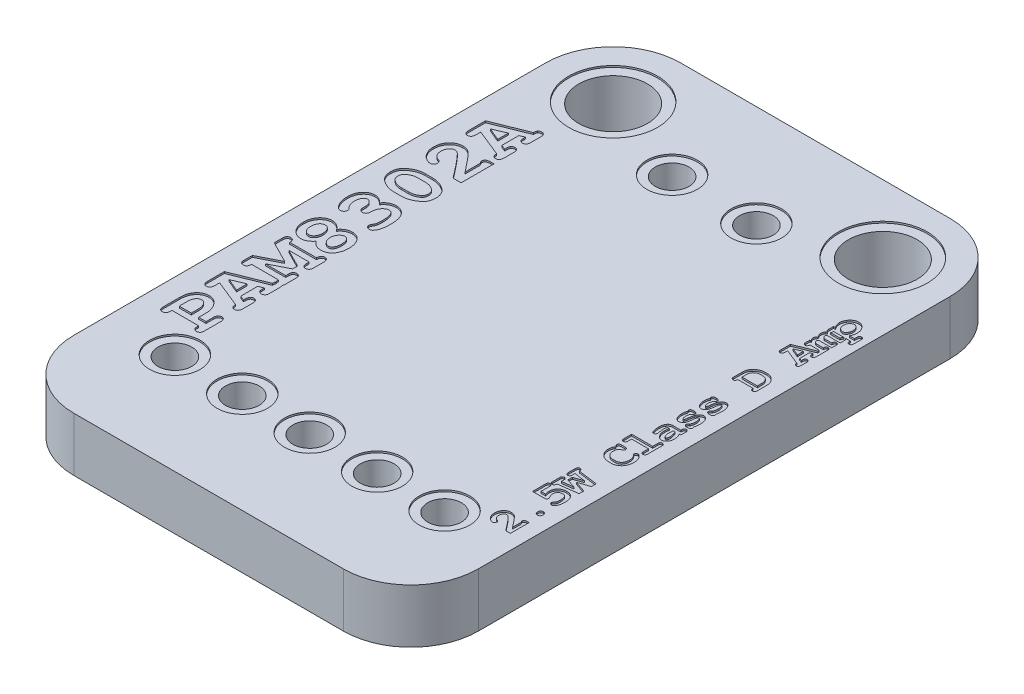
from build123d import *

# Parameters (mm, degrees)
SKETCH1_R           = 0.9525
SKETCH1_R_2         = 1.675
BOSS_EXTRUDE1_DEPTH = 1.016
SKETCH1_3_R         = 1.675
SKETCH1_3_R_2       = 1.294
SKETCH1_3_R_3       = 0.9525
SKETCH1_3_R_4       = 0.635
BOSS_EXTRUDE2_DEPTH = 0.9525
CUT_EXTRUDE1_DEPTH  = 0.0635


with BuildPart() as part:
    # Sketch1 → Boss-Extrude1 (new, symmetric)
    with BuildSketch(Plane(origin=(0, 0, 0), x_dir=(1, 0, 0), z_dir=(0, 1, 0))):
        with BuildLine():
            ThreePointArc((-7.62, -8.89), (-6.876051224, -10.686051224), (-5.08, -11.43))
            Line((-5.08, -11.43), (5.08, -11.43))
            ThreePointArc((5.08, -11.43), (6.876051224, -10.686051224), (7.62, -8.89))
            Line((7.62, -8.89), (7.62, 8.89))
            ThreePointArc((7.62, 8.89), (6.876051224, 10.686051224), (5.08, 11.43))
            Line((5.08, 11.43), (-5.08, 11.43))
            ThreePointArc((-5.08, 11.43), (-6.876051224, 10.686051224), (-7.62, 8.89))
            Line((-7.62, 8.89), (-7.62, -8.89))
        make_face()
        with Locations((-5.08, -7.62)):
            Circle(SKETCH1_R, mode=Mode.SUBTRACT)
        with Locations((-2.54, -7.62)):
            Circle(SKETCH1_R, mode=Mode.SUBTRACT)
        with Locations((0, -7.62)):
            Circle(SKETCH1_R, mode=Mode.SUBTRACT)
        with Locations((2.54, -7.62)):
            Circle(SKETCH1_R, mode=Mode.SUBTRACT)
        with Locations((5.08, -7.62)):
            Circle(SKETCH1_R, mode=Mode.SUBTRACT)
        with Locations((-5.08, 8.89)):
            Circle(SKETCH1_R_2, mode=Mode.SUBTRACT)
        with Locations((-1.5875, 7.62)):
            Circle(SKETCH1_R, mode=Mode.SUBTRACT)
        with Locations((1.5875, 7.62)):
            Circle(SKETCH1_R, mode=Mode.SUBTRACT)
        with Locations((5.08, 8.89)):
            Circle(SKETCH1_R_2, mode=Mode.SUBTRACT)
    extrude(amount=BOSS_EXTRUDE1_DEPTH, both=True)

    # Sketch1<3> → Boss-Extrude2 (add, symmetric)
    # profile 1 of 9: a face of its own
    with BuildSketch(Plane(origin=(0, 0, 0), x_dir=(1, 0, 0), z_dir=(0, 1, 0))):
        with Locations((-5.08, 8.89)):
            Circle(SKETCH1_3_R)
        with Locations((-5.08, 8.89)):
            Circle(SKETCH1_3_R_2, mode=Mode.SUBTRACT)
    # profile 2 of 9: a face of its own
    with BuildSketch(Plane(origin=(0, 0, 0), x_dir=(1, 0, 0), z_dir=(0, 1, 0))):
        with Locations((5.08, 8.89)):
            Circle(SKETCH1_3_R)
        with Locations((5.08, 8.89)):
            Circle(SKETCH1_3_R_2, mode=Mode.SUBTRACT)
    # profile 3 of 9: a face of its own
    with BuildSketch(Plane(origin=(0, 0, 0), x_dir=(1, 0, 0), z_dir=(0, 1, 0))):
        with Locations((-1.5875, 7.62)):
            Circle(SKETCH1_3_R_3)
        with Locations((-1.5875, 7.62)):
            Circle(SKETCH1_3_R_4, mode=Mode.SUBTRACT)
    # profile 4 of 9: a face of its own
    with BuildSketch(Plane(origin=(0, 0, 0), x_dir=(1, 0, 0), z_dir=(0, 1, 0))):
        with Locations((1.5875, 7.62)):
            Circle(SKETCH1_3_R_3)
        with Locations((1.5875, 7.62)):
            Circle(SKETCH1_3_R_4, mode=Mode.SUBTRACT)
    # profile 5 of 9: a face of its own
    with BuildSketch(Plane(origin=(0, 0, 0), x_dir=(1, 0, 0), z_dir=(0, 1, 0))):
        with Locations((0, -7.62)):
            Circle(SKETCH1_3_R_3)
        with Locations((0, -7.62)):
            Circle(SKETCH1_3_R_4, mode=Mode.SUBTRACT)
    # profile 6 of 9: a face of its own
    with BuildSketch(Plane(origin=(0, 0, 0), x_dir=(1, 0, 0), z_dir=(0, 1, 0))):
        with Locations((-5.08, -7.62)):
            Circle(SKETCH1_3_R_3)
        with Locations((-5.08, -7.62)):
            Circle(SKETCH1_3_R_4, mode=Mode.SUBTRACT)
    # profile 7 of 9: a face of its own
    with BuildSketch(Plane(origin=(0, 0, 0), x_dir=(1, 0, 0), z_dir=(0, 1, 0))):
        with Locations((5.08, -7.62)):
            Circle(SKETCH1_3_R_3)
        with Locations((5.08, -7.62)):
            Circle(SKETCH1_3_R_4, mode=Mode.SUBTRACT)
    # profile 8 of 9: a face of its own
    with BuildSketch(Plane(origin=(0, 0, 0), x_dir=(1, 0, 0), z_dir=(0, 1, 0))):
        with Locations((2.54, -7.62)):
            Circle(SKETCH1_3_R_3)
        with Locations((2.54, -7.62)):
            Circle(SKETCH1_3_R_4, mode=Mode.SUBTRACT)
    # profile 9 of 9: a face of its own
    with BuildSketch(Plane(origin=(0, 0, 0), x_dir=(1, 0, 0), z_dir=(0, 1, 0))):
        with Locations((-2.54, -7.62)):
            Circle(SKETCH1_3_R_3)
        with Locations((-2.54, -7.62)):
            Circle(SKETCH1_3_R_4, mode=Mode.SUBTRACT)
    extrude(amount=BOSS_EXTRUDE2_DEPTH, both=True)

    # Sketch3 → Cut-Extrude1 (cut, symmetric)
    # profile 1 of 21: a face of its own
    with BuildSketch(Plane(origin=(0, 1.016, 0), x_dir=(1, 0, 0), z_dir=(0, 1, 0))):
        with BuildLine():
            Line((-5.753369329, 6.010341741), (-5.753369329, 5.372248023))
            Line((-5.753369329, 5.372248023), (-5.57679985, 5.297363646))
            Line((-5.57679985, 5.297363646), (-5.57679985, 5.37303628))
            add(Edge.make_bspline(
                [(-5.57679985, 5.37303628), (-5.576470241, 5.387925618), (-5.57585558, 5.41569153), (-5.568317632, 5.45381504), (-5.556852191, 5.485815547), (-5.539438027, 5.510912786), (-5.518127772, 5.529784081), (-5.493840428, 5.543054585), (-5.466828361, 5.551237224), (-5.447847294, 5.552241367), (-5.438066688, 5.552758785)],
                knots=[0, 0, 0, 0, 1.385037207, 2.582842954, 3.60572078, 4.529232137, 5.396267832, 6.234398563, 7.090217058, 8, 8, 8, 8], degree=3))
            add(Edge.make_bspline(
                [(-5.438066688, 5.552758785), (-5.428289757, 5.552234903), (-5.40931582, 5.551218213), (-5.382364301, 5.543158059), (-5.358350318, 5.529648248), (-5.337053641, 5.510939805), (-5.319763032, 5.48572649), (-5.307678204, 5.453921067), (-5.300323974, 5.41567301), (-5.299679254, 5.387919153), (-5.299333527, 5.37303628)],
                knots=[0, 0, 0, 0, 0.910493844, 1.766981072, 2.595054736, 3.462767929, 4.387000915, 5.415138821, 6.61388053, 8, 8, 8, 8], degree=3))
            Line((-5.299333527, 5.37303628), (-5.299333527, 4.999796779))
            add(Edge.make_bspline(
                [(-5.299333527, 4.999796779), (-5.299674582, 4.98504444), (-5.300310231, 4.957549418), (-5.307732563, 4.919572756), (-5.319784655, 4.887922762), (-5.336923085, 4.862661314), (-5.35849006, 4.844396771), (-5.382346966, 4.83083771), (-5.409320539, 4.822802586), (-5.428291362, 4.821782362), (-5.438066688, 4.821256659)],
                knots=[0, 0, 0, 0, 1.3794613, 2.57100363, 3.603312595, 4.531295108, 5.394417369, 6.225850451, 7.085812368, 8, 8, 8, 8], degree=3))
            add(Edge.make_bspline(
                [(-5.438066688, 4.821256659), (-5.447845692, 4.821775892), (-5.466823651, 4.82278356), (-5.493857821, 4.830941141), (-5.517986702, 4.844262677), (-5.539568759, 4.862688292), (-5.556830903, 4.887833454), (-5.568264953, 4.919678151), (-5.575868732, 4.957531134), (-5.576474713, 4.985038055), (-5.57679985, 4.999796779)],
                knots=[0, 0, 0, 0, 0.913470953, 1.772758702, 2.614286986, 3.476732601, 4.40398762, 5.431011913, 6.621620131, 8, 8, 8, 8], degree=3))
            Line((-5.57679985, 4.999796779), (-6.585768299, 5.40771957))
            Line((-6.585768299, 5.40771957), (-6.585768299, 5.231150092))
            add(Edge.make_bspline(
                [(-6.585768299, 5.231150092), (-6.586120025, 5.215876043), (-6.586777, 5.187346206), (-6.594069636, 5.148037152), (-6.606147539, 5.11547116), (-6.623233409, 5.089719053), (-6.644935009, 5.071422277), (-6.66877897, 5.057853542), (-6.695756065, 5.04982105), (-6.71472639, 5.048800455), (-6.724501461, 5.04827456)],
                knots=[0, 0, 0, 0, 1.405670394, 2.625600438, 3.66387865, 4.58694345, 5.436218663, 6.254313086, 7.100478656, 8, 8, 8, 8], degree=3))
            add(Edge.make_bspline(
                [(-6.724501461, 5.04827456), (-6.734280203, 5.048793989), (-6.753257654, 5.049802036), (-6.780295434, 5.057956917), (-6.804410939, 5.071288459), (-6.826128521, 5.089745714), (-6.843337735, 5.11538374), (-6.854792634, 5.14814184), (-6.862272862, 5.187327825), (-6.862899265, 5.215869634), (-6.863234622, 5.231150092)],
                knots=[0, 0, 0, 0, 0.898816686, 1.744319395, 2.572347545, 3.420957461, 4.34329916, 5.37645638, 6.595430766, 8, 8, 8, 8], degree=3))
            Line((-6.863234622, 5.231150092), (-6.863234622, 5.864120142))
            Line((-6.863234622, 5.864120142), (-5.57679985, 6.383187114))
            add(Edge.make_bspline(
                [(-5.57679985, 6.383187114), (-5.57657391, 6.397537735), (-5.576161941, 6.423703912), (-5.571566904, 6.458656689), (-5.564814504, 6.486353824), (-5.555589353, 6.499877209), (-5.551575639, 6.505761015)],
                knots=[0, 0, 0, 0, 1.352211735, 2.465552615, 3.332386717, 4, 4, 4, 4], degree=3))
            add(Edge.make_bspline(
                [(-5.551575639, 6.505761015), (-5.542920358, 6.514238752), (-5.5263587, 6.530460686), (-5.498106281, 6.548563492), (-5.46840777, 6.559574846), (-5.44813823, 6.561012761), (-5.438066688, 6.561727234)],
                knots=[0, 0, 0, 0, 1.115062852, 2.133644248, 3.072643895, 4, 4, 4, 4], degree=3))
            add(Edge.make_bspline(
                [(-5.438066688, 6.561727234), (-5.428289401, 6.561203594), (-5.409314772, 6.560187374), (-5.382368151, 6.552123893), (-5.358336106, 6.53862635), (-5.337192483, 6.519941058), (-5.319636697, 6.49504639), (-5.307768304, 6.463382889), (-5.30029902, 6.425443336), (-5.299670667, 6.397942547), (-5.299333527, 6.383187114)],
                knots=[0, 0, 0, 0, 0.914412616, 1.774586171, 2.60622387, 3.477671707, 4.395800623, 5.428363642, 6.620199212, 8, 8, 8, 8], degree=3))
            Line((-5.299333527, 6.383187114), (-5.299333527, 6.009159357))
            add(Edge.make_bspline(
                [(-5.299333527, 6.009159357), (-5.299667505, 5.994404269), (-5.300289966, 5.966904125), (-5.307820998, 5.928839964), (-5.319679624, 5.896979929), (-5.336931449, 5.871632967), (-5.35848798, 5.853364424), (-5.382347531, 5.839806376), (-5.409320385, 5.831770976), (-5.428291309, 5.830750791), (-5.438066688, 5.830225108)],
                knots=[0, 0, 0, 0, 1.37749161, 2.567332575, 3.609590486, 4.536247962, 5.398137798, 6.228383703, 7.087117707, 8, 8, 8, 8], degree=3))
            add(Edge.make_bspline(
                [(-5.438066688, 5.830225108), (-5.447845742, 5.830744323), (-5.466823799, 5.831751954), (-5.493857274, 5.83990979), (-5.517988732, 5.853230383), (-5.539560713, 5.871659688), (-5.556935441, 5.896891862), (-5.568177431, 5.928943724), (-5.575888522, 5.966886254), (-5.576481624, 5.994398028), (-5.57679985, 6.009159357)],
                knots=[0, 0, 0, 0, 0.91216205, 1.770218533, 2.610540999, 3.471750824, 4.397677188, 5.434692992, 6.623595199, 8, 8, 8, 8], degree=3))
            Line((-5.57679985, 6.009159357), (-5.57679985, 6.08483199))
            Line((-5.57679985, 6.08483199), (-5.753369329, 6.010341741))
        make_face()
        Polygon((-6.030835652, 5.893285636), (-6.508125024, 5.691491946), (-6.030835652, 5.489304128), align=None, mode=Mode.SUBTRACT)
    # profile 2 of 21: a face of its own
    with BuildSketch(Plane(origin=(0, 1.016, 0), x_dir=(1, 0, 0), z_dir=(0, 1, 0))):
        with BuildLine():
            Line((-5.57679985, 3.81228821), (-5.57679985, 4.392445068))
            add(Edge.make_bspline(
                [(-5.57679985, 4.392445068), (-5.584428529, 4.399831827), (-5.598646198, 4.413598623), (-5.614581297, 4.436261848), (-5.625220247, 4.458436154), (-5.626593916, 4.473536607), (-5.627248272, 4.480729808)],
                knots=[0, 0, 0, 0, 1.217610585, 2.269276574, 3.175558455, 4, 4, 4, 4], degree=3))
            add(Edge.make_bspline(
                [(-5.627248272, 4.480729808), (-5.626814895, 4.490921005), (-5.625980915, 4.510532675), (-5.616812123, 4.538138306), (-5.60230869, 4.562514023), (-5.581563959, 4.583550026), (-5.553688406, 4.600719451), (-5.517637297, 4.611316728), (-5.47421912, 4.61846819), (-5.442571472, 4.619113791), (-5.425454583, 4.619462969)],
                knots=[0, 0, 0, 0, 0.8764423, 1.68660234, 2.479771974, 3.305406923, 4.211406152, 5.272483391, 6.524800363, 8, 8, 8, 8], degree=3))
            Line((-5.425454583, 4.619462969), (-5.299333527, 4.619462969))
            Line((-5.299333527, 4.619462969), (-5.299333527, 3.383476619))
            Line((-5.299333527, 3.383476619), (-5.602024061, 3.383476619))
            add(Edge.make_bspline(
                [(-5.602024061, 3.383476619), (-5.624857092, 3.413188015), (-5.669371428, 3.471112127), (-5.734919232, 3.555492658), (-5.797187355, 3.635503928), (-5.856188596, 3.711138114), (-5.912144464, 3.782090967), (-5.965046713, 3.848366355), (-6.01475249, 3.910207013), (-6.06102876, 3.967916893), (-6.105013988, 4.020450943), (-6.144967676, 4.069225539), (-6.182562571, 4.112870467), (-6.216707752, 4.152163316), (-6.247541489, 4.187136784), (-6.2753787, 4.217379817), (-6.300231377, 4.243126205), (-6.316018445, 4.258476308), (-6.323278851, 4.265535756)],
                knots=[0, 0, 0, 0, 1.577714685, 3.075847547, 4.498781567, 5.84652098, 7.114723331, 8.303420737, 9.41696084, 10.455355152, 11.417855225, 12.301739227, 13.109909001, 13.843101261, 14.493566416, 15.072925291, 15.573642284, 16, 16, 16, 16], degree=3))
            add(Edge.make_bspline(
                [(-6.323278851, 4.265535756), (-6.336496676, 4.277119142), (-6.361308372, 4.298862771), (-6.401048727, 4.323362006), (-6.440129338, 4.338994468), (-6.466354448, 4.341022077), (-6.47895953, 4.341996646)],
                knots=[0, 0, 0, 0, 1.18732021, 2.228765262, 3.148657204, 4, 4, 4, 4], degree=3))
            add(Edge.make_bspline(
                [(-6.47895953, 4.341996646), (-6.493946222, 4.340896168), (-6.523844864, 4.338700699), (-6.567076822, 4.321819126), (-6.606949226, 4.294125629), (-6.643226814, 4.256709745), (-6.674153001, 4.21062147), (-6.696138029, 4.15631377), (-6.709828577, 4.095158321), (-6.711182319, 4.051995889), (-6.711889355, 4.029452904)],
                knots=[0, 0, 0, 0, 0.831207498, 1.658269457, 2.541057172, 3.511546171, 4.538047402, 5.604972623, 6.749118963, 8, 8, 8, 8], degree=3))
            add(Edge.make_bspline(
                [(-6.711889355, 4.029452904), (-6.711750534, 4.017742526), (-6.7114781, 3.994761219), (-6.706711803, 3.961073398), (-6.700346408, 3.928810313), (-6.690700444, 3.898081689), (-6.678435232, 3.868992936), (-6.663915803, 3.841049335), (-6.646071942, 3.815056132), (-6.63241884, 3.799035555), (-6.625575257, 3.791005282)],
                knots=[0, 0, 0, 0, 1.081487442, 2.122390656, 3.139427783, 4.118937024, 5.093313167, 6.054890068, 7.02501856, 8, 8, 8, 8], degree=3))
            add(Edge.make_bspline(
                [(-6.625575257, 3.791005282), (-6.617140682, 3.782832922), (-6.5997103, 3.765944419), (-6.567539418, 3.74522425), (-6.530672912, 3.726185245), (-6.503402183, 3.716455842), (-6.489206865, 3.711391365)],
                knots=[0, 0, 0, 0, 0.882127715, 1.822951676, 2.866774227, 4, 4, 4, 4], degree=3))
            add(Edge.make_bspline(
                [(-6.489206865, 3.711391365), (-6.48030886, 3.708065425), (-6.463526364, 3.70179238), (-6.441009453, 3.689456888), (-6.422477205, 3.675225092), (-6.408029226, 3.65878596), (-6.397237978, 3.640515361), (-6.389097395, 3.620672822), (-6.384938132, 3.598577716), (-6.384303148, 3.583314337), (-6.383974609, 3.575417102)],
                knots=[0, 0, 0, 0, 1.224930256, 2.310336477, 3.300857815, 4.226085761, 5.115985937, 6.02917, 6.980297379, 8, 8, 8, 8], degree=3))
            add(Edge.make_bspline(
                [(-6.383974609, 3.575417102), (-6.384317888, 3.566018991), (-6.384988808, 3.547650873), (-6.393613172, 3.521403058), (-6.406247293, 3.496947306), (-6.423865158, 3.47516251), (-6.444864819, 3.45734294), (-6.467919507, 3.443671329), (-6.49302098, 3.435612744), (-6.510435495, 3.434488378), (-6.519160616, 3.433925042)],
                knots=[0, 0, 0, 0, 1.037817544, 2.028360457, 3.031671367, 4.078039141, 5.1112471, 6.070564231, 7.033302973, 8, 8, 8, 8], degree=3))
            add(Edge.make_bspline(
                [(-6.519160616, 3.433925042), (-6.533564304, 3.435008032), (-6.564765435, 3.437353994), (-6.613359211, 3.452395791), (-6.666842974, 3.475725103), (-6.724005215, 3.507255105), (-6.781023987, 3.54778277), (-6.833000399, 3.598125216), (-6.879155384, 3.656612261), (-6.918042104, 3.723093413), (-6.949867148, 3.795111653), (-6.972835562, 3.871191053), (-6.986528542, 3.950396732), (-6.988404949, 4.004175264), (-6.989355679, 4.031423545)],
                knots=[0, 0, 0, 0, 0.623729078, 1.351115928, 2.186853086, 3.149238325, 4.172131241, 5.205972238, 6.271072203, 7.388006413, 8.531504614, 9.672326041, 10.820623896, 12, 12, 12, 12], degree=3))
            add(Edge.make_bspline(
                [(-6.989355679, 4.031423545), (-6.988904542, 4.05246105), (-6.988019335, 4.093740181), (-6.980984737, 4.154207088), (-6.968501134, 4.211593258), (-6.952281599, 4.266303869), (-6.930296126, 4.317818284), (-6.903802749, 4.366540935), (-6.872610899, 4.412439825), (-6.83677852, 4.454798082), (-6.797660699, 4.493125535), (-6.756114569, 4.527025071), (-6.712254546, 4.555332035), (-6.666555809, 4.5790057), (-6.618756906, 4.597003278), (-6.569030963, 4.610304993), (-6.517149556, 4.617705243), (-6.481871757, 4.618871546), (-6.463982654, 4.619462969)],
                knots=[0, 0, 0, 0, 1.147022454, 2.250651463, 3.312884734, 4.346269268, 5.357489973, 6.360890103, 7.366308507, 8.378036598, 9.381078636, 10.348862156, 11.296686471, 12.222626857, 13.149979519, 14.07614158, 15.024426024, 16, 16, 16, 16], degree=3))
            add(Edge.make_bspline(
                [(-6.463982654, 4.619462969), (-6.445817983, 4.618973615), (-6.409931677, 4.618006841), (-6.357260366, 4.609092082), (-6.306616522, 4.594372254), (-6.265726188, 4.577013174), (-6.232477852, 4.559446554), (-6.206194588, 4.541259018), (-6.177835116, 4.519658291), (-6.147773636, 4.493789984), (-6.116009521, 4.463754618), (-6.082143322, 4.42992971), (-6.046553872, 4.391912694), (-6.022744144, 4.36479424), (-6.01034098, 4.350667469)],
                knots=[0, 0, 0, 0, 1.193685221, 2.358256416, 3.50099512, 4.654620854, 5.273063836, 5.970294707, 6.752999257, 7.616921079, 8.576448771, 9.627118403, 10.763898652, 12, 12, 12, 12], degree=3))
            add(Edge.make_bspline(
                [(-6.01034098, 4.350667469), (-5.999279376, 4.337814746), (-5.974896735, 4.309484013), (-5.935672951, 4.262661912), (-5.890262589, 4.20781521), (-5.838942417, 4.144685571), (-5.782064124, 4.07299893), (-5.718982727, 3.993401629), (-5.649803681, 3.905700776), (-5.601867516, 3.844363718), (-5.57679985, 3.81228821)],
                knots=[0, 0, 0, 0, 0.588702177, 1.297652159, 2.120476163, 3.060746225, 4.122083368, 5.297401033, 6.586706995, 8, 8, 8, 8], degree=3))
        make_face()
    # profile 3 of 21: a face of its own
    with BuildSketch(Plane(origin=(0, 1.016, 0), x_dir=(1, 0, 0), z_dir=(0, 1, 0))):
        with BuildLine():
            Line((-6.274012813, 3.005113451), (-5.98945218, 3.005113451))
            add(Edge.make_bspline(
                [(-5.98945218, 3.005113451), (-5.968546334, 3.004645182), (-5.926746618, 3.003708911), (-5.864355965, 2.996548293), (-5.802698518, 2.983981016), (-5.741510253, 2.967787135), (-5.68133851, 2.945663649), (-5.621753074, 2.919338349), (-5.562890877, 2.887885289), (-5.505218522, 2.852709278), (-5.450874478, 2.813381453), (-5.403719443, 2.768376069), (-5.363273601, 2.719696712), (-5.330855584, 2.666316944), (-5.305295342, 2.608993691), (-5.287359429, 2.547479185), (-5.275880825, 2.481876085), (-5.274709896, 2.436698752), (-5.274109315, 2.413526872)],
                knots=[0, 0, 0, 0, 0.97101068, 1.941465067, 2.91209213, 3.892112578, 4.878572125, 5.886709357, 6.91590503, 7.976167713, 9.023406667, 10.024872329, 10.996132279, 11.954849357, 12.916514192, 13.903200234, 14.924531643, 16, 16, 16, 16], degree=3))
            add(Edge.make_bspline(
                [(-5.274109315, 2.413526872), (-5.274875187, 2.387191559), (-5.276359586, 2.336148901), (-5.289653403, 2.262890027), (-5.310674016, 2.195628036), (-5.336450981, 2.144642984), (-5.362034767, 2.106735926), (-5.384833115, 2.07887381), (-5.411648308, 2.051676692), (-5.441411369, 2.02439951), (-5.47532246, 1.998123011), (-5.512337882, 1.971524149), (-5.553412408, 1.945735733), (-5.597312285, 1.920354793), (-5.643365611, 1.896779608), (-5.690852617, 1.876381813), (-5.738744488, 1.858463324), (-5.78764074, 1.844238923), (-5.837155638, 1.833254196), (-5.887305891, 1.825390111), (-5.938116123, 1.820453832), (-5.97223067, 1.819870166), (-5.98945218, 1.819575523)],
                knots=[0, 0, 0, 0, 1.524890165, 2.955516269, 4.298936836, 5.596112062, 6.248564095, 6.946509653, 7.678699252, 8.460167216, 9.284125641, 10.162918051, 11.100640052, 12.09307145, 13.100859748, 14.096497906, 15.086444238, 16.062119689, 17.04475007, 18.023509543, 19.002239409, 20, 20, 20, 20], degree=3))
            Line((-5.98945218, 1.819575523), (-6.274012813, 1.819575523))
            add(Edge.make_bspline(
                [(-6.274012813, 1.819575523), (-6.294922915, 1.82002149), (-6.336600573, 1.820910382), (-6.3987738, 1.828367523), (-6.460394945, 1.839951283), (-6.52110484, 1.857267339), (-6.581463989, 1.878415876), (-6.64086844, 1.905200362), (-6.700229865, 1.935795014), (-6.757829826, 1.97124061), (-6.812189587, 2.01051451), (-6.85939695, 2.055498816), (-6.899600839, 2.104274863), (-6.932797372, 2.157123615), (-6.9581226, 2.214541894), (-6.976118751, 2.276019333), (-6.98755785, 2.341502842), (-6.988747292, 2.386546322), (-6.989355679, 2.409585589)],
                knots=[0, 0, 0, 0, 0.972169454, 1.937711541, 2.908324554, 3.885243988, 4.870818575, 5.880158885, 6.913151822, 7.974679789, 9.023168485, 10.025829264, 10.998248285, 11.956123907, 12.918936363, 13.906799885, 14.929350119, 16, 16, 16, 16], degree=3))
            add(Edge.make_bspline(
                [(-6.989355679, 2.409585589), (-6.988555932, 2.435784141), (-6.987010718, 2.48640311), (-6.974217189, 2.559325041), (-6.953208237, 2.626134097), (-6.927544465, 2.677056265), (-6.902448754, 2.714998194), (-6.879572274, 2.742819224), (-6.85316625, 2.770144728), (-6.823480396, 2.797624263), (-6.789688358, 2.824326651), (-6.752529276, 2.850995053), (-6.711476299, 2.877065483), (-6.667737712, 2.902755384), (-6.621587287, 2.926790366), (-6.573981928, 2.947529598), (-6.525714759, 2.965374976), (-6.476806148, 2.980153128), (-6.427046459, 2.990873828), (-6.376736324, 2.999506329), (-6.325601559, 3.0041623), (-6.291231325, 3.00479599), (-6.274012813, 3.005113451)],
                knots=[0, 0, 0, 0, 1.51627267, 2.929633689, 4.272154596, 5.558240775, 6.216572328, 6.903346435, 7.640522834, 8.415851628, 9.243989418, 10.132806045, 11.063485473, 12.05906749, 13.069651879, 14.074636623, 15.063920009, 16.048394187, 17.030366521, 18.009682876, 19.002907588, 20, 20, 20, 20], degree=3))
        make_face()
        with BuildLine():
            add(Edge.make_bspline(
                [(-6.269677402, 2.727647128), (-6.286509029, 2.727251228), (-6.319606826, 2.72647273), (-6.368517582, 2.720817745), (-6.415776113, 2.711536604), (-6.461403375, 2.697811542), (-6.505617832, 2.68111719), (-6.548009819, 2.659957184), (-6.588765116, 2.635157358), (-6.614297631, 2.615933638), (-6.627151771, 2.606255611)],
                knots=[0, 0, 0, 0, 1.049207124, 2.063166173, 3.065513159, 4.047746601, 5.030389763, 6.008413687, 6.997351873, 8, 8, 8, 8], degree=3))
            add(Edge.make_bspline(
                [(-6.627151771, 2.606255611), (-6.633872257, 2.600366706), (-6.647255473, 2.588639507), (-6.664506891, 2.568429953), (-6.679261875, 2.546644739), (-6.691144367, 2.523019802), (-6.70072086, 2.497698359), (-6.707282022, 2.470424345), (-6.711341223, 2.441502025), (-6.711703936, 2.421686125), (-6.711889355, 2.411556231)],
                knots=[0, 0, 0, 0, 0.974188309, 1.940004324, 2.890477883, 3.839544373, 4.819624155, 5.838580792, 6.895081844, 8, 8, 8, 8], degree=3))
            add(Edge.make_bspline(
                [(-6.711889355, 2.411556231), (-6.711568105, 2.401686298), (-6.710935319, 2.382244891), (-6.706493741, 2.353846918), (-6.699477158, 2.326669527), (-6.689107267, 2.301076864), (-6.676126421, 2.276710369), (-6.659625535, 2.254222915), (-6.640712172, 2.232732478), (-6.626244402, 2.219864267), (-6.618875076, 2.213309696)],
                knots=[0, 0, 0, 0, 1.04475133, 2.05791026, 3.036385248, 4.010201984, 4.97493562, 5.951629221, 6.956638645, 8, 8, 8, 8], degree=3))
            add(Edge.make_bspline(
                [(-6.618875076, 2.213309696), (-6.606967839, 2.20398757), (-6.583162822, 2.185350722), (-6.544332595, 2.162082816), (-6.503878052, 2.141370344), (-6.460801664, 2.125743493), (-6.416051271, 2.112293442), (-6.369032621, 2.103395901), (-6.319975289, 2.098332043), (-6.286636796, 2.097476874), (-6.269677402, 2.097041847)],
                knots=[0, 0, 0, 0, 0.965268288, 1.929769895, 2.886975816, 3.864465241, 4.852564279, 5.869892509, 6.916407759, 8, 8, 8, 8], degree=3))
            Line((-6.269677402, 2.097041847), (-5.993787592, 2.097041847))
            add(Edge.make_bspline(
                [(-5.993787592, 2.097041847), (-5.976959467, 2.097457528), (-5.943738023, 2.098278149), (-5.894621797, 2.10368356), (-5.847237894, 2.113751869), (-5.801488165, 2.127100471), (-5.757247687, 2.143984941), (-5.715187057, 2.165620693), (-5.674229489, 2.190162022), (-5.649002558, 2.209758549), (-5.636313223, 2.219615748)],
                knots=[0, 0, 0, 0, 1.047646913, 2.068224619, 3.070717092, 4.059335543, 5.032886762, 6.01311384, 7.000581435, 8, 8, 8, 8], degree=3))
            add(Edge.make_bspline(
                [(-5.636313223, 2.219615748), (-5.629614406, 2.225523442), (-5.616348679, 2.237222499), (-5.598830377, 2.257066857), (-5.584222335, 2.278849189), (-5.572315297, 2.3024528), (-5.56274566, 2.32778019), (-5.556182477, 2.355052485), (-5.55210588, 2.384105732), (-5.551755752, 2.404053575), (-5.551575639, 2.414315129)],
                knots=[0, 0, 0, 0, 0.973760188, 1.928345797, 2.878401656, 3.827051066, 4.806700137, 5.825208979, 6.881245737, 8, 8, 8, 8], degree=3))
            add(Edge.make_bspline(
                [(-5.551575639, 2.414315129), (-5.551892453, 2.424185028), (-5.552512331, 2.443496485), (-5.556953135, 2.471642544), (-5.564084481, 2.498511332), (-5.574224398, 2.523948703), (-5.587583292, 2.548089045), (-5.603698805, 2.570821314), (-5.622662972, 2.59232642), (-5.637212092, 2.604968506), (-5.644589918, 2.611379279)],
                knots=[0, 0, 0, 0, 1.049669389, 2.053784454, 3.023361696, 4.001762574, 4.958768438, 5.951438829, 6.961179231, 8, 8, 8, 8], degree=3))
            add(Edge.make_bspline(
                [(-5.644589918, 2.611379279), (-5.656497572, 2.620700244), (-5.680303423, 2.639334769), (-5.719127417, 2.662620035), (-5.759496009, 2.683210655), (-5.802476147, 2.699110643), (-5.847307484, 2.712314216), (-5.8944274, 2.721309109), (-5.943491015, 2.726352707), (-5.976828639, 2.727210676), (-5.993787592, 2.727647128)],
                knots=[0, 0, 0, 0, 0.965243175, 1.92971969, 2.886900708, 3.856513169, 4.852646163, 5.869947926, 6.916435949, 8, 8, 8, 8], degree=3))
            Line((-5.993787592, 2.727647128), (-6.269677402, 2.727647128))
        make_face(mode=Mode.SUBTRACT)
    # profile 4 of 21: a face of its own
    with BuildSketch(Plane(origin=(0, 1.016, 0), x_dir=(1, 0, 0), z_dir=(0, 1, 0))):
        with BuildLine():
            add(Edge.make_bspline(
                [(-6.184151561, 1.184634832), (-6.170883776, 1.203081381), (-6.145012682, 1.23905064), (-6.100559171, 1.286396917), (-6.05342061, 1.326969061), (-6.002470637, 1.359442717), (-5.948443215, 1.384933914), (-5.891354275, 1.403122877), (-5.831167663, 1.414039473), (-5.790068949, 1.415330521), (-5.769134461, 1.415988144)],
                knots=[0, 0, 0, 0, 1.097870941, 2.140758347, 3.132418489, 4.098219304, 5.053176109, 6.013612254, 6.988191934, 8, 8, 8, 8], degree=3))
            add(Edge.make_bspline(
                [(-5.769134461, 1.415988144), (-5.746324973, 1.414992031), (-5.701125917, 1.413018143), (-5.634829601, 1.397494994), (-5.571568442, 1.37188191), (-5.511567462, 1.336726067), (-5.456035089, 1.292095337), (-5.407265091, 1.237694997), (-5.366495847, 1.173811365), (-5.33862685, 1.114569181), (-5.319880045, 1.062640499), (-5.307842819, 1.01990295), (-5.297201495, 0.974291183), (-5.288461475, 0.925771263), (-5.282399808, 0.874283298), (-5.277749603, 0.819997521), (-5.274311145, 0.762698068), (-5.274177754, 0.723510121), (-5.274109315, 0.703404177)],
                knots=[0, 0, 0, 0, 1.120848616, 2.221062547, 3.328404776, 4.466383221, 5.628748911, 6.818250916, 8.042204279, 9.342711773, 10.029369771, 10.755298249, 11.524770231, 12.332044891, 13.178270492, 14.073208588, 15.011431715, 16, 16, 16, 16], degree=3))
            add(Edge.make_bspline(
                [(-5.274109315, 0.703404177), (-5.274391931, 0.677384211), (-5.274939107, 0.627006541), (-5.279698366, 0.554000409), (-5.287481688, 0.485973652), (-5.298331437, 0.422883005), (-5.312539817, 0.364837357), (-5.329339199, 0.311593968), (-5.349518672, 0.263236671), (-5.366427318, 0.233973659), (-5.374612032, 0.219808752)],
                knots=[0, 0, 0, 0, 1.249332019, 2.418851671, 3.511219396, 4.535913872, 5.490662898, 6.378455454, 7.215083279, 8, 8, 8, 8], degree=3))
            add(Edge.make_bspline(
                [(-5.374612032, 0.219808752), (-5.383899083, 0.206186643), (-5.401349617, 0.180590458), (-5.434664276, 0.151514165), (-5.471215388, 0.132563033), (-5.497236842, 0.13055374), (-5.510192167, 0.129553371)],
                knots=[0, 0, 0, 0, 1.158142999, 2.176171116, 3.091968619, 4, 4, 4, 4], degree=3))
            add(Edge.make_bspline(
                [(-5.510192167, 0.129553371), (-5.519841885, 0.129927286), (-5.538539813, 0.130651808), (-5.565433976, 0.138693801), (-5.59001252, 0.151253134), (-5.611601208, 0.168782932), (-5.629789499, 0.189413629), (-5.643104004, 0.213000358), (-5.650773081, 0.238919939), (-5.651898866, 0.256807551), (-5.652472484, 0.265921763)],
                knots=[0, 0, 0, 0, 1.053850316, 2.042009713, 3.045860934, 4.059255755, 5.068966979, 6.041607071, 7.002146913, 8, 8, 8, 8], degree=3))
            add(Edge.make_bspline(
                [(-5.652472484, 0.265921763), (-5.652178753, 0.272520876), (-5.651576823, 0.286044197), (-5.64615183, 0.306286679), (-5.63719411, 0.326676564), (-5.629369816, 0.339835703), (-5.625277631, 0.346718065)],
                knots=[0, 0, 0, 0, 0.915178223, 1.87544133, 2.888834431, 4, 4, 4, 4], degree=3))
            add(Edge.make_bspline(
                [(-5.625277631, 0.346718065), (-5.618781621, 0.356325334), (-5.606190213, 0.374947389), (-5.591140919, 0.403624127), (-5.578742201, 0.431168653), (-5.573195764, 0.449648147), (-5.570493797, 0.458650502)],
                knots=[0, 0, 0, 0, 1.1106095, 2.152727439, 3.100094243, 4, 4, 4, 4], degree=3))
            add(Edge.make_bspline(
                [(-5.570493797, 0.458650502), (-5.56751071, 0.473328783), (-5.561049819, 0.505119594), (-5.55571758, 0.557208997), (-5.552126339, 0.616774659), (-5.551766214, 0.658991941), (-5.551575639, 0.681332992)],
                knots=[0, 0, 0, 0, 0.802341852, 1.737744341, 2.802832264, 4, 4, 4, 4], degree=3))
            add(Edge.make_bspline(
                [(-5.551575639, 0.681332992), (-5.55167371, 0.700781105), (-5.551862674, 0.738253701), (-5.554783026, 0.79227339), (-5.558902424, 0.842271049), (-5.56519479, 0.888031703), (-5.572905197, 0.929815516), (-5.582743309, 0.967198553), (-5.594037171, 1.00066038), (-5.60739201, 1.029990832), (-5.622627569, 1.055401731), (-5.638597346, 1.077806423), (-5.656622069, 1.096494683), (-5.675757859, 1.112122921), (-5.696897541, 1.123596875), (-5.719019893, 1.132506535), (-5.74301176, 1.137747312), (-5.759518842, 1.138259931), (-5.767952076, 1.13852182)],
                knots=[0, 0, 0, 0, 1.665483637, 3.209051528, 4.632226431, 5.960991685, 7.163718818, 8.269076059, 9.269007152, 10.185356896, 11.022874388, 11.803831757, 12.536005973, 13.240687357, 13.910644657, 14.58765186, 15.278451452, 16, 16, 16, 16], degree=3))
            add(Edge.make_bspline(
                [(-5.767952076, 1.13852182), (-5.780653716, 1.137743777), (-5.806465588, 1.136162661), (-5.8444662, 1.123520435), (-5.881564697, 1.103404684), (-5.917006402, 1.075649011), (-5.950451879, 1.04189912), (-5.980165087, 1.002130408), (-6.005439643, 0.956757423), (-6.018827497, 0.924008903), (-6.025711984, 0.907168508)],
                knots=[0, 0, 0, 0, 0.828855112, 1.684373086, 2.591111131, 3.577022922, 4.615393608, 5.688824016, 6.811515226, 8, 8, 8, 8], degree=3))
            add(Edge.make_bspline(
                [(-6.025711984, 0.907168508), (-6.029195573, 0.895393818), (-6.03711908, 0.868611998), (-6.045248968, 0.822268238), (-6.051709486, 0.765536608), (-6.054533661, 0.724178086), (-6.056059863, 0.701827664)],
                knots=[0, 0, 0, 0, 0.707695204, 1.609670054, 2.708249672, 4, 4, 4, 4], degree=3))
            add(Edge.make_bspline(
                [(-6.056059863, 0.701827664), (-6.056976685, 0.690985843), (-6.058739691, 0.670137507), (-6.067614475, 0.64123339), (-6.080308661, 0.615805815), (-6.097730128, 0.595150387), (-6.118121628, 0.578440992), (-6.141410422, 0.567151198), (-6.166735686, 0.55956431), (-6.184488147, 0.558772072), (-6.19361064, 0.558364962)],
                knots=[0, 0, 0, 0, 1.174716359, 2.258927009, 3.25110318, 4.230664473, 5.161208315, 6.083347564, 7.015085873, 8, 8, 8, 8], degree=3))
            add(Edge.make_bspline(
                [(-6.19361064, 0.558364962), (-6.203119852, 0.55892735), (-6.221657283, 0.560023678), (-6.248458861, 0.567735071), (-6.272802705, 0.580910457), (-6.293949681, 0.599283286), (-6.311952133, 0.621014545), (-6.32402864, 0.646715892), (-6.332546827, 0.674616814), (-6.333193367, 0.694401816), (-6.333526187, 0.704586562)],
                knots=[0, 0, 0, 0, 1.00927207, 1.967493382, 2.935114695, 3.92481386, 4.927118676, 5.906735753, 6.922448312, 8, 8, 8, 8], degree=3))
            add(Edge.make_bspline(
                [(-6.333526187, 0.704586562), (-6.333518471, 0.715622241), (-6.333503958, 0.736379829), (-6.333598207, 0.765412881), (-6.333314577, 0.790378788), (-6.334130025, 0.811259604), (-6.33364472, 0.828087762), (-6.334525599, 0.840814866), (-6.334080576, 0.849379321), (-6.33455125, 0.853699544), (-6.334708572, 0.855143572)],
                knots=[0, 0, 0, 0, 1.758838091, 3.308290695, 4.627419264, 5.737359861, 6.637717455, 7.308078099, 7.76872617, 8, 8, 8, 8], degree=3))
            add(Edge.make_bspline(
                [(-6.334708572, 0.855143572), (-6.337289632, 0.873705583), (-6.342581166, 0.911760299), (-6.360412511, 0.956992138), (-6.378004761, 0.99182213), (-6.394509579, 1.015509043), (-6.413422209, 1.036319297), (-6.434302398, 1.05447323), (-6.456423936, 1.069469649), (-6.479433176, 1.080192747), (-6.502869787, 1.087053706), (-6.518720808, 1.087733423), (-6.526649054, 1.088073398)],
                knots=[0, 0, 0, 0, 1.706156571, 3.497859469, 4.404728844, 5.266681909, 6.124534197, 6.966467591, 7.788331473, 8.555861704, 9.277681691, 10, 10, 10, 10], degree=3))
            add(Edge.make_bspline(
                [(-6.526649054, 1.088073398), (-6.538882739, 1.08703635), (-6.563443281, 1.084954357), (-6.598661908, 1.069196272), (-6.630585847, 1.043440845), (-6.653704862, 1.01479596), (-6.670890172, 0.987822699), (-6.681549846, 0.96403897), (-6.691320924, 0.93821489), (-6.698573649, 0.909619681), (-6.704409048, 0.878676845), (-6.708706437, 0.845252652), (-6.711578985, 0.809475094), (-6.711783813, 0.784731979), (-6.711889355, 0.771982501)],
                knots=[0, 0, 0, 0, 1.084051371, 2.176358964, 3.36441638, 4.698418817, 5.426852316, 6.199362592, 7.00777849, 7.876578401, 8.814759852, 9.803177442, 10.86803494, 12, 12, 12, 12], degree=3))
            add(Edge.make_bspline(
                [(-6.711889355, 0.771982501), (-6.711503049, 0.755543839), (-6.710749805, 0.723490728), (-6.705141603, 0.676947963), (-6.696248217, 0.633194804), (-6.683205624, 0.592529564), (-6.666637072, 0.554828845), (-6.646462294, 0.52017551), (-6.622252097, 0.488713312), (-6.603466416, 0.470266663), (-6.594044993, 0.461015272)],
                knots=[0, 0, 0, 0, 1.15112623, 2.244536446, 3.278607213, 4.273832925, 5.229609485, 6.157563074, 7.075978242, 8, 8, 8, 8], degree=3))
            add(Edge.make_bspline(
                [(-6.594044993, 0.461015272), (-6.588886652, 0.456058382), (-6.579305219, 0.446851136), (-6.566507846, 0.433566539), (-6.556977358, 0.421537543), (-6.552330924, 0.413633186), (-6.550296752, 0.410172721)],
                knots=[0, 0, 0, 0, 1.274654296, 2.367624473, 3.285358848, 4, 4, 4, 4], degree=3))
            add(Edge.make_bspline(
                [(-6.550296752, 0.410172721), (-6.545833041, 0.400210975), (-6.536624371, 0.379659817), (-6.535763472, 0.35713966), (-6.535319877, 0.34553568)],
                knots=[0, 0, 0, 0, 0.969458361, 2, 2, 2, 2], degree=3))
            add(Edge.make_bspline(
                [(-6.535319877, 0.34553568), (-6.535660284, 0.336135389), (-6.536325593, 0.31776301), (-6.544990746, 0.29154617), (-6.557458911, 0.26698712), (-6.575682992, 0.245665401), (-6.597313034, 0.227914007), (-6.621647421, 0.214473716), (-6.648785287, 0.206908603), (-6.667570737, 0.205796446), (-6.677206065, 0.205226005)],
                knots=[0, 0, 0, 0, 1.012046573, 1.977992433, 2.956389237, 3.974794697, 4.9841466, 5.969221958, 6.958384783, 8, 8, 8, 8], degree=3))
            add(Edge.make_bspline(
                [(-6.677206065, 0.205226005), (-6.684994145, 0.205612893), (-6.700789362, 0.20639755), (-6.724314625, 0.212710334), (-6.747678829, 0.22261586), (-6.770709497, 0.236631823), (-6.793278658, 0.254827573), (-6.816116953, 0.276422639), (-6.838638459, 0.302185765), (-6.852487862, 0.321372728), (-6.859687468, 0.331347061)],
                knots=[0, 0, 0, 0, 0.810402016, 1.643598185, 2.520607143, 3.447764793, 4.441714979, 5.535699057, 6.718934318, 8, 8, 8, 8], degree=3))
            add(Edge.make_bspline(
                [(-6.859687468, 0.331347061), (-6.870099203, 0.346932366), (-6.891061061, 0.378310128), (-6.917211946, 0.428856017), (-6.93937018, 0.482190828), (-6.957977879, 0.53810382), (-6.972238622, 0.597167358), (-6.981641977, 0.65903358), (-6.988444754, 0.723617787), (-6.989047662, 0.767628168), (-6.989355679, 0.790112403)],
                knots=[0, 0, 0, 0, 0.928115393, 1.868566895, 2.813939142, 3.78759634, 4.78541168, 5.820270149, 6.886409155, 8, 8, 8, 8], degree=3))
            add(Edge.make_bspline(
                [(-6.989355679, 0.790112403), (-6.989025387, 0.811280539), (-6.988379655, 0.852664928), (-6.981932754, 0.913152916), (-6.971427443, 0.970525074), (-6.956423237, 1.024568566), (-6.937519543, 1.075449887), (-6.914184056, 1.123009085), (-6.886447086, 1.167283146), (-6.854993326, 1.208160251), (-6.82060997, 1.245075453), (-6.783729064, 1.277080653), (-6.745486411, 1.304577394), (-6.705240048, 1.326822771), (-6.663385486, 1.34435469), (-6.619667587, 1.35643263), (-6.574364326, 1.364358611), (-6.543499261, 1.365142037), (-6.527831439, 1.365539721)],
                knots=[0, 0, 0, 0, 1.233909546, 2.412332984, 3.542174892, 4.631264227, 5.678463978, 6.702803711, 7.71454892, 8.719660425, 9.706031618, 10.650772534, 11.562642774, 12.447304408, 13.326476671, 14.20193672, 15.087261419, 16, 16, 16, 16], degree=3))
            add(Edge.make_bspline(
                [(-6.527831439, 1.365539721), (-6.511632152, 1.365047574), (-6.479391237, 1.364068069), (-6.432014933, 1.355030591), (-6.386235424, 1.340785339), (-6.342215236, 1.320850399), (-6.299690705, 1.295436585), (-6.259120574, 1.26406742), (-6.220065753, 1.227047897), (-6.196370244, 1.199064554), (-6.184151561, 1.184634832)],
                knots=[0, 0, 0, 0, 0.965442285, 1.921488469, 2.865804375, 3.819825069, 4.796869706, 5.814099319, 6.872831634, 8, 8, 8, 8], degree=3))
        make_face()
    # profile 5 of 21: a face of its own
    with BuildSketch(Plane(origin=(0, 1.016, 0), x_dir=(1, 0, 0), z_dir=(0, 1, 0))):
        with BuildLine():
            add(Edge.make_bspline(
                [(-6.123849931, -0.481345494), (-6.111186449, -0.464894677), (-6.086443122, -0.432751229), (-6.044422246, -0.390532225), (-5.999970606, -0.354543673), (-5.952794274, -0.325266352), (-5.903259871, -0.302043538), (-5.850991637, -0.285948504), (-5.796469792, -0.275692892), (-5.759195828, -0.274590828), (-5.740363095, -0.274034008)],
                knots=[0, 0, 0, 0, 1.097564139, 2.144543599, 3.143314072, 4.117420344, 5.075319558, 6.029503864, 7.004403504, 8, 8, 8, 8], degree=3))
            add(Edge.make_bspline(
                [(-5.740363095, -0.274034008), (-5.719421064, -0.27492076), (-5.678095579, -0.276670612), (-5.617245669, -0.289038249), (-5.559509322, -0.310809723), (-5.504155803, -0.339891003), (-5.452861314, -0.378264351), (-5.40741758, -0.426970128), (-5.368011263, -0.485248847), (-5.334574833, -0.551991274), (-5.307830697, -0.625188817), (-5.287797276, -0.703010847), (-5.276412034, -0.785011638), (-5.27488668, -0.84101893), (-5.274109315, -0.86956187)],
                knots=[0, 0, 0, 0, 0.889306211, 1.754892368, 2.623476717, 3.502128795, 4.402706588, 5.330311028, 6.317727827, 7.380760842, 8.492944865, 9.621606998, 10.787901939, 12, 12, 12, 12], degree=3))
            add(Edge.make_bspline(
                [(-5.274109315, -0.86956187), (-5.274871666, -0.898106795), (-5.27636061, -0.953857739), (-5.287860279, -1.035448684), (-5.307706578, -1.11253756), (-5.334487329, -1.184714016), (-5.368110326, -1.25006278), (-5.407631494, -1.307289886), (-5.453385631, -1.3553917), (-5.504891835, -1.393574488), (-5.560194039, -1.422959952), (-5.61806253, -1.443862202), (-5.678416667, -1.45710805), (-5.719537699, -1.458743617), (-5.740363095, -1.459571936)],
                knots=[0, 0, 0, 0, 1.219550107, 2.381896954, 3.512059143, 4.615295404, 5.664874754, 6.644513106, 7.577617866, 8.488225805, 9.372279885, 10.244272733, 11.110826902, 12, 12, 12, 12], degree=3))
            add(Edge.make_bspline(
                [(-5.740363095, -1.459571936), (-5.759194668, -1.4590125), (-5.796466337, -1.457905258), (-5.851005002, -1.447687593), (-5.903158296, -1.431468089), (-5.952880676, -1.408806765), (-6.000091247, -1.379460074), (-6.044292571, -1.343048476), (-6.08646228, -1.300877274), (-6.111192935, -1.268718904), (-6.123849931, -1.25226045)],
                knots=[0, 0, 0, 0, 0.995414347, 1.970135624, 2.924145358, 3.878964862, 4.852892916, 5.855848756, 6.902636665, 8, 8, 8, 8], degree=3))
            add(Edge.make_bspline(
                [(-6.123849931, -1.25226045), (-6.13750576, -1.268530831), (-6.164127938, -1.300250105), (-6.207446952, -1.34248005), (-6.252340403, -1.378188974), (-6.298021798, -1.40812763), (-6.345263007, -1.431294571), (-6.393913561, -1.447507433), (-6.443836151, -1.457878494), (-6.477727123, -1.4590063), (-6.494724662, -1.459571936)],
                knots=[0, 0, 0, 0, 1.158066375, 2.257662247, 3.292798896, 4.282598856, 5.231183039, 6.153420132, 7.073873938, 8, 8, 8, 8], degree=3))
            add(Edge.make_bspline(
                [(-6.494724662, -1.459571936), (-6.511302897, -1.458980511), (-6.544101561, -1.457810427), (-6.592436449, -1.450340127), (-6.638833499, -1.437222474), (-6.683402672, -1.418750864), (-6.726585071, -1.395606917), (-6.767497991, -1.366479551), (-6.806949689, -1.332704703), (-6.84389075, -1.293916657), (-6.878230107, -1.251341242), (-6.907692864, -1.204893025), (-6.933263726, -1.155842201), (-6.953559311, -1.103539516), (-6.969875463, -1.04860926), (-6.98123784, -0.990684142), (-6.987969544, -0.92976103), (-6.988886714, -0.888103266), (-6.989355679, -0.866802972)],
                knots=[0, 0, 0, 0, 0.925483791, 1.830992874, 2.722524856, 3.610490334, 4.519467507, 5.451322037, 6.408263585, 7.414518753, 8.437314466, 9.456528066, 10.479902061, 11.520371691, 12.58319097, 13.674843876, 14.811109719, 16, 16, 16, 16], degree=3))
            add(Edge.make_bspline(
                [(-6.989355679, -0.866802972), (-6.988886676, -0.845502703), (-6.987969431, -0.803844988), (-6.981238259, -0.742921525), (-6.969873974, -0.684997667), (-6.953564667, -0.630062893), (-6.933244321, -0.57777655), (-6.907814856, -0.528764268), (-6.878090028, -0.4826226), (-6.843936032, -0.440037112), (-6.806783274, -0.401363857), (-6.767782576, -0.367012074), (-6.726321918, -0.338549335), (-6.683540056, -0.314744162), (-6.638812466, -0.296419369), (-6.592442162, -0.283256066), (-6.544100087, -0.275798033), (-6.511302402, -0.274626278), (-6.494724662, -0.274034008)],
                knots=[0, 0, 0, 0, 1.189042856, 2.32545452, 3.417247522, 4.480203195, 5.520806353, 6.544311681, 7.557488846, 8.580415819, 9.586800122, 10.548658591, 11.47643819, 12.389046319, 13.277125752, 14.168772149, 15.074397438, 16, 16, 16, 16], degree=3))
            add(Edge.make_bspline(
                [(-6.494724662, -0.274034008), (-6.477463975, -0.274592183), (-6.443180226, -0.275700848), (-6.392738476, -0.286094856), (-6.34385769, -0.30225929), (-6.296613703, -0.325160042), (-6.250449694, -0.35400138), (-6.206470679, -0.390350907), (-6.163470566, -0.432740589), (-6.137346262, -0.464788772), (-6.123849931, -0.481345494)],
                knots=[0, 0, 0, 0, 0.938998311, 1.865069667, 2.792687421, 3.736714781, 4.717312312, 5.749782929, 6.837493515, 8, 8, 8, 8], degree=3))
        make_face()
        with BuildLine():
            add(Edge.make_bspline(
                [(-6.485659711, -0.551500332), (-6.500941999, -0.55234904), (-6.531108905, -0.554024372), (-6.573860162, -0.571832995), (-6.613347792, -0.598615909), (-6.647595217, -0.636611149), (-6.67652486, -0.682880874), (-6.697468237, -0.73740192), (-6.709499129, -0.799410409), (-6.711067021, -0.843100149), (-6.711889355, -0.866014715)],
                knots=[0, 0, 0, 0, 0.847121745, 1.672199937, 2.541145178, 3.489005328, 4.498428115, 5.566822144, 6.723837307, 8, 8, 8, 8], degree=3))
            add(Edge.make_bspline(
                [(-6.711889355, -0.866014715), (-6.711065038, -0.889058792), (-6.709493009, -0.93300543), (-6.697481279, -0.995420741), (-6.676476345, -1.050262164), (-6.647879016, -1.096984303), (-6.61305169, -1.134482851), (-6.574101522, -1.161981079), (-6.530970522, -1.178953375), (-6.500916432, -1.181044214), (-6.485659711, -1.182105612)],
                knots=[0, 0, 0, 0, 1.279543027, 2.440176505, 3.512105893, 4.524640296, 5.464261581, 6.334688897, 7.154617952, 8, 8, 8, 8], degree=3))
            add(Edge.make_bspline(
                [(-6.485659711, -1.182105612), (-6.470293913, -1.180995269), (-6.439782247, -1.178790475), (-6.395946302, -1.16243522), (-6.357037306, -1.134196772), (-6.321903603, -1.097041534), (-6.29268732, -1.050456463), (-6.272548128, -0.995260917), (-6.259573518, -0.933092124), (-6.258444909, -0.889077197), (-6.257853553, -0.866014715)],
                knots=[0, 0, 0, 0, 0.849545739, 1.6869321, 2.548250826, 3.489461321, 4.502181565, 5.567636262, 6.725515458, 8, 8, 8, 8], degree=3))
            add(Edge.make_bspline(
                [(-6.257853553, -0.866014715), (-6.258442958, -0.843081623), (-6.259567596, -0.79932317), (-6.272560357, -0.737562711), (-6.292640401, -0.682685445), (-6.322189141, -0.636557509), (-6.356741922, -0.598903008), (-6.396187282, -0.571379061), (-6.439645989, -0.554185221), (-6.470268815, -0.552398387), (-6.485659711, -0.551500332)],
                knots=[0, 0, 0, 0, 1.271114396, 2.425403355, 3.487312292, 4.496969052, 5.446377182, 6.306173337, 7.148690263, 8, 8, 8, 8], degree=3))
        make_face(mode=Mode.SUBTRACT)
        with BuildLine():
            add(Edge.make_bspline(
                [(-5.73681594, -0.551500332), (-5.752084425, -0.552539312), (-5.78291884, -0.554637513), (-5.827403938, -0.572955424), (-5.869052687, -0.602242917), (-5.906804489, -0.642012721), (-5.939936427, -0.689152472), (-5.963309872, -0.743782632), (-5.977912875, -0.803504563), (-5.979546705, -0.845300862), (-5.98038723, -0.866802972)],
                knots=[0, 0, 0, 0, 0.831705099, 1.679612572, 2.58771935, 3.59805191, 4.661448436, 5.719158959, 6.826621145, 8, 8, 8, 8], degree=3))
            add(Edge.make_bspline(
                [(-5.98038723, -0.866802972), (-5.979565828, -0.888310535), (-5.977974055, -0.9299895), (-5.963148284, -0.989634097), (-5.940048779, -1.044372335), (-5.906772958, -1.091674056), (-5.868782459, -1.131482826), (-5.826381359, -1.160110157), (-5.781583028, -1.17920129), (-5.750136486, -1.181139064), (-5.73445117, -1.182105612)],
                knots=[0, 0, 0, 0, 1.167950831, 2.263342506, 3.322711925, 4.381189202, 5.391837245, 6.297605528, 7.150857504, 8, 8, 8, 8], degree=3))
            add(Edge.make_bspline(
                [(-5.73445117, -1.182105612), (-5.722457605, -1.181256538), (-5.69816521, -1.179536779), (-5.664006371, -1.163117648), (-5.632303264, -1.138236826), (-5.609647643, -1.109844199), (-5.592691869, -1.083117175), (-5.581722039, -1.059466048), (-5.57224051, -1.033522463), (-5.564927496, -1.004963122), (-5.558975604, -0.974034812), (-5.554798325, -0.940593334), (-5.551867706, -0.904559701), (-5.551675282, -0.8796843), (-5.551575639, -0.866802972)],
                knots=[0, 0, 0, 0, 1.065358648, 2.15783324, 3.319684793, 4.644737104, 5.377304796, 6.143582804, 6.96760399, 7.841334738, 8.773315843, 9.778978458, 10.849879509, 12, 12, 12, 12], degree=3))
            add(Edge.make_bspline(
                [(-5.551575639, -0.866802972), (-5.55167791, -0.853921708), (-5.551876448, -0.8289154), (-5.55480651, -0.792620836), (-5.558938217, -0.758908997), (-5.564931969, -0.727855848), (-5.572234629, -0.699292102), (-5.581739755, -0.673361956), (-5.592585858, -0.649766996), (-5.609741491, -0.623404031), (-5.632589207, -0.595126336), (-5.664544, -0.570053332), (-5.699705005, -0.554053165), (-5.724439054, -0.552351728), (-5.73681594, -0.551500332)],
                knots=[0, 0, 0, 0, 1.143351499, 2.219580238, 3.23089313, 4.157389094, 5.025977531, 5.845148971, 6.606917078, 7.325297834, 8.63358653, 9.814173683, 10.906215399, 12, 12, 12, 12], degree=3))
        make_face(mode=Mode.SUBTRACT)
    # profile 6 of 21: a face of its own
    with BuildSketch(Plane(origin=(0, 1.016, 0), x_dir=(1, 0, 0), z_dir=(0, 1, 0))):
        with BuildLine():
            Line((-6.345350036, -2.947800398), (-5.57679985, -2.947800398))
            Line((-5.57679985, -2.947800398), (-5.57679985, -2.846903553))
            add(Edge.make_bspline(
                [(-5.57679985, -2.846903553), (-5.576461056, -2.832538169), (-5.575824634, -2.805552857), (-5.568256191, -2.768367105), (-5.556874875, -2.736837389), (-5.539306659, -2.712144219), (-5.518140384, -2.693299667), (-5.493837041, -2.680040721), (-5.466829278, -2.671854973), (-5.447847605, -2.670851267), (-5.438066688, -2.670334075)],
                knots=[0, 0, 0, 0, 1.352093726, 2.539902206, 3.563435288, 4.487816108, 5.365197979, 6.213329969, 7.079360787, 8, 8, 8, 8], degree=3))
            add(Edge.make_bspline(
                [(-5.438066688, -2.670334075), (-5.428289448, -2.670857734), (-5.409314912, -2.671873991), (-5.382367637, -2.679937206), (-5.358338004, -2.693435729), (-5.337184836, -2.712117144), (-5.31973939, -2.736927016), (-5.307741947, -2.768260668), (-5.300353341, -2.805570963), (-5.299687814, -2.832544459), (-5.299333527, -2.846903553)],
                knots=[0, 0, 0, 0, 0.921361348, 1.788071466, 2.626028881, 3.504098956, 4.429204845, 5.458105536, 6.646845713, 8, 8, 8, 8], degree=3))
            Line((-5.299333527, -2.846903553), (-5.299333527, -3.225266721))
            add(Edge.make_bspline(
                [(-5.299333527, -3.225266721), (-5.299691573, -3.239622842), (-5.300364163, -3.266590753), (-5.307706782, -3.303937419), (-5.319886582, -3.335258798), (-5.336915345, -3.360434742), (-5.358491985, -3.378695293), (-5.382346442, -3.392255366), (-5.409320682, -3.400290214), (-5.42829141, -3.401310477), (-5.438066688, -3.4018362)],
                knots=[0, 0, 0, 0, 1.352818826, 2.541264301, 3.569909917, 4.504942534, 5.37462214, 6.212371816, 7.078867067, 8, 8, 8, 8], degree=3))
            add(Edge.make_bspline(
                [(-5.438066688, -3.4018362), (-5.447845646, -3.401316949), (-5.466823515, -3.400309246), (-5.493858323, -3.392151917), (-5.517984839, -3.378829446), (-5.539576137, -3.360407483), (-5.556729631, -3.335349449), (-5.568291465, -3.303830992), (-5.57581376, -3.266608842), (-5.576457279, -3.239629126), (-5.57679985, -3.225266721)],
                knots=[0, 0, 0, 0, 0.920411156, 1.786227444, 2.634149338, 3.503147485, 4.437447433, 5.460726969, 6.648241209, 8, 8, 8, 8], degree=3))
            Line((-5.57679985, -3.225266721), (-6.585768299, -3.225266721))
            add(Edge.make_bspline(
                [(-6.585768299, -3.225266721), (-6.586126346, -3.239622842), (-6.586798935, -3.266590753), (-6.594141555, -3.303937419), (-6.606321354, -3.335258798), (-6.623350117, -3.360434742), (-6.644926757, -3.378695293), (-6.668781215, -3.392255366), (-6.695755454, -3.400290214), (-6.714726183, -3.401310477), (-6.724501461, -3.4018362)],
                knots=[0, 0, 0, 0, 1.352818826, 2.541264301, 3.569909917, 4.504942534, 5.37462214, 6.212371816, 7.078867067, 8, 8, 8, 8], degree=3))
            add(Edge.make_bspline(
                [(-6.724501461, -3.4018362), (-6.734280418, -3.401316949), (-6.753258287, -3.400309246), (-6.780293096, -3.392151917), (-6.804419612, -3.378829446), (-6.826010909, -3.360407483), (-6.843164404, -3.335349449), (-6.854726238, -3.303830992), (-6.862248533, -3.266608842), (-6.862892051, -3.239629126), (-6.863234622, -3.225266721)],
                knots=[0, 0, 0, 0, 0.920411156, 1.786227444, 2.634149338, 3.503147485, 4.437447433, 5.460726969, 6.648241209, 8, 8, 8, 8], degree=3))
            Line((-6.863234622, -3.225266721), (-6.863234622, -2.91942316))
            Line((-6.863234622, -2.91942316), (-6.056059863, -2.506376702))
            Line((-6.056059863, -2.506376702), (-6.863234622, -2.094512628))
            Line((-6.863234622, -2.094512628), (-6.863234622, -1.787486682))
            add(Edge.make_bspline(
                [(-6.863234622, -1.787486682), (-6.862895829, -1.773121297), (-6.862259406, -1.746135985), (-6.854690963, -1.708950234), (-6.843309648, -1.677420517), (-6.825741431, -1.652727347), (-6.804575157, -1.633882796), (-6.780271814, -1.620623849), (-6.75326405, -1.612438102), (-6.734282378, -1.611434395), (-6.724501461, -1.610917203)],
                knots=[0, 0, 0, 0, 1.352093726, 2.539902206, 3.563435288, 4.487816108, 5.365197979, 6.213329969, 7.079360787, 8, 8, 8, 8], degree=3))
            add(Edge.make_bspline(
                [(-6.724501461, -1.610917203), (-6.714724221, -1.611440862), (-6.695749685, -1.612457119), (-6.668802409, -1.620520335), (-6.644772777, -1.634018858), (-6.623619609, -1.652700272), (-6.606174162, -1.677510144), (-6.59417672, -1.708843797), (-6.586788114, -1.746154092), (-6.586122586, -1.773127588), (-6.585768299, -1.787486682)],
                knots=[0, 0, 0, 0, 0.921361348, 1.788071466, 2.626028881, 3.504098956, 4.429204845, 5.458105536, 6.646845713, 8, 8, 8, 8], degree=3))
            Line((-6.585768299, -1.787486682), (-5.57679985, -1.787486682))
            add(Edge.make_bspline(
                [(-5.57679985, -1.787486682), (-5.576461056, -1.773121297), (-5.575824634, -1.746135985), (-5.568256191, -1.708950234), (-5.556874875, -1.677420517), (-5.539306659, -1.652727347), (-5.518140384, -1.633882796), (-5.493837041, -1.620623849), (-5.466829278, -1.612438102), (-5.447847605, -1.611434395), (-5.438066688, -1.610917203)],
                knots=[0, 0, 0, 0, 1.352093726, 2.539902206, 3.563435288, 4.487816108, 5.365197979, 6.213329969, 7.079360787, 8, 8, 8, 8], degree=3))
            add(Edge.make_bspline(
                [(-5.438066688, -1.610917203), (-5.428289448, -1.611440862), (-5.409314912, -1.612457119), (-5.382367637, -1.620520335), (-5.358338004, -1.634018858), (-5.337184836, -1.652700272), (-5.31973939, -1.677510144), (-5.307741947, -1.708843797), (-5.300353341, -1.746154092), (-5.299687814, -1.773127588), (-5.299333527, -1.787486682)],
                knots=[0, 0, 0, 0, 0.921361348, 1.788071466, 2.626028881, 3.504098956, 4.429204845, 5.458105536, 6.646845713, 8, 8, 8, 8], degree=3))
            Line((-5.299333527, -1.787486682), (-5.299333527, -2.16584985))
            add(Edge.make_bspline(
                [(-5.299333527, -2.16584985), (-5.299691573, -2.180205971), (-5.300364163, -2.207173881), (-5.307706782, -2.244520547), (-5.319886582, -2.275841927), (-5.336915345, -2.30101787), (-5.358491985, -2.319278421), (-5.382346442, -2.332838494), (-5.409320682, -2.340873343), (-5.42829141, -2.341893605), (-5.438066688, -2.342419329)],
                knots=[0, 0, 0, 0, 1.352818826, 2.541264301, 3.569909917, 4.504942534, 5.37462214, 6.212371816, 7.078867067, 8, 8, 8, 8], degree=3))
            add(Edge.make_bspline(
                [(-5.438066688, -2.342419329), (-5.447845646, -2.341900077), (-5.466823515, -2.340892374), (-5.493858323, -2.332735045), (-5.517984839, -2.319412575), (-5.539576137, -2.300990612), (-5.556729631, -2.275932578), (-5.568291465, -2.244414121), (-5.57581376, -2.20719197), (-5.576457279, -2.180212255), (-5.57679985, -2.16584985)],
                knots=[0, 0, 0, 0, 0.920411156, 1.786227444, 2.634149338, 3.503147485, 4.437447433, 5.460726969, 6.648241209, 8, 8, 8, 8], degree=3))
            Line((-5.57679985, -2.16584985), (-5.57679985, -2.064953005))
            Line((-5.57679985, -2.064953005), (-6.345350036, -2.064953005))
            Line((-6.345350036, -2.064953005), (-5.665478718, -2.411785909))
            Line((-5.665478718, -2.411785909), (-5.665478718, -2.599785109))
            Line((-5.665478718, -2.599785109), (-6.345350036, -2.947800398))
        make_face()
    # profile 7 of 21: a face of its own
    with BuildSketch(Plane(origin=(0, 1.016, 0), x_dir=(1, 0, 0), z_dir=(0, 1, 0))):
        with BuildLine():
            Line((-5.753369329, -3.827100636), (-5.753369329, -4.465194354))
            Line((-5.753369329, -4.465194354), (-5.57679985, -4.540078732))
            Line((-5.57679985, -4.540078732), (-5.57679985, -4.464406098))
            add(Edge.make_bspline(
                [(-5.57679985, -4.464406098), (-5.576470241, -4.44951676), (-5.57585558, -4.421750848), (-5.568317632, -4.383627337), (-5.556852191, -4.35162683), (-5.539438027, -4.326529592), (-5.518127772, -4.307658297), (-5.493840428, -4.294387793), (-5.466828361, -4.286205154), (-5.447847294, -4.28520101), (-5.438066688, -4.284683593)],
                knots=[0, 0, 0, 0, 1.385037207, 2.582842954, 3.60572078, 4.529232137, 5.396267832, 6.234398563, 7.090217058, 8, 8, 8, 8], degree=3))
            add(Edge.make_bspline(
                [(-5.438066688, -4.284683593), (-5.428289757, -4.285207475), (-5.40931582, -4.286224164), (-5.382364301, -4.294284319), (-5.358350318, -4.307794129), (-5.337053641, -4.326502573), (-5.319763032, -4.351715888), (-5.307678204, -4.38352131), (-5.300323974, -4.421769368), (-5.299679254, -4.449523225), (-5.299333527, -4.464406098)],
                knots=[0, 0, 0, 0, 0.910493844, 1.766981072, 2.595054736, 3.462767929, 4.387000915, 5.415138821, 6.61388053, 8, 8, 8, 8], degree=3))
            Line((-5.299333527, -4.464406098), (-5.299333527, -4.837645598))
            add(Edge.make_bspline(
                [(-5.299333527, -4.837645598), (-5.299674582, -4.852397938), (-5.300310231, -4.87989296), (-5.307732563, -4.917869621), (-5.319784655, -4.949519615), (-5.336923085, -4.974781063), (-5.35849006, -4.993045606), (-5.382346966, -5.006604668), (-5.409320539, -5.014639791), (-5.428291362, -5.015660015), (-5.438066688, -5.016185718)],
                knots=[0, 0, 0, 0, 1.3794613, 2.57100363, 3.603312595, 4.531295108, 5.394417369, 6.225850451, 7.085812368, 8, 8, 8, 8], degree=3))
            add(Edge.make_bspline(
                [(-5.438066688, -5.016185718), (-5.447845692, -5.015666485), (-5.466823651, -5.014658818), (-5.493857821, -5.006501237), (-5.517986702, -4.9931797), (-5.539568759, -4.974754086), (-5.556830903, -4.949608924), (-5.568264953, -4.917764226), (-5.575868732, -4.879911243), (-5.576474713, -4.852404322), (-5.57679985, -4.837645598)],
                knots=[0, 0, 0, 0, 0.913470953, 1.772758702, 2.614286986, 3.476732601, 4.40398762, 5.431011913, 6.621620131, 8, 8, 8, 8], degree=3))
            Line((-5.57679985, -4.837645598), (-6.585768299, -4.429722807))
            Line((-6.585768299, -4.429722807), (-6.585768299, -4.606292286))
            add(Edge.make_bspline(
                [(-6.585768299, -4.606292286), (-6.586120025, -4.621566334), (-6.586777, -4.650096172), (-6.594069636, -4.689405225), (-6.606147539, -4.721971217), (-6.623233409, -4.747723324), (-6.644935009, -4.766020101), (-6.66877897, -4.779588835), (-6.695756065, -4.787621327), (-6.71472639, -4.788641923), (-6.724501461, -4.789167817)],
                knots=[0, 0, 0, 0, 1.405670394, 2.625600438, 3.66387865, 4.58694345, 5.436218663, 6.254313086, 7.100478656, 8, 8, 8, 8], degree=3))
            add(Edge.make_bspline(
                [(-6.724501461, -4.789167817), (-6.734280203, -4.788648389), (-6.753257654, -4.787640341), (-6.780295434, -4.77948546), (-6.804410939, -4.766153918), (-6.826128521, -4.747696663), (-6.843337735, -4.722058638), (-6.854792634, -4.689300538), (-6.862272862, -4.650114553), (-6.862899265, -4.621572744), (-6.863234622, -4.606292286)],
                knots=[0, 0, 0, 0, 0.898816686, 1.744319395, 2.572347545, 3.420957461, 4.34329916, 5.37645638, 6.595430766, 8, 8, 8, 8], degree=3))
            Line((-6.863234622, -4.606292286), (-6.863234622, -3.973322236))
            Line((-6.863234622, -3.973322236), (-5.57679985, -3.454255264))
            add(Edge.make_bspline(
                [(-5.57679985, -3.454255264), (-5.57657391, -3.439904643), (-5.576161941, -3.413738466), (-5.571566904, -3.378785689), (-5.564814504, -3.351088553), (-5.555589353, -3.337565169), (-5.551575639, -3.331681363)],
                knots=[0, 0, 0, 0, 1.352211735, 2.465552615, 3.332386717, 4, 4, 4, 4], degree=3))
            add(Edge.make_bspline(
                [(-5.551575639, -3.331681363), (-5.542920358, -3.323203625), (-5.5263587, -3.306981692), (-5.498106281, -3.288878885), (-5.46840777, -3.277867531), (-5.44813823, -3.276429616), (-5.438066688, -3.275715144)],
                knots=[0, 0, 0, 0, 1.115062852, 2.133644248, 3.072643895, 4, 4, 4, 4], degree=3))
            add(Edge.make_bspline(
                [(-5.438066688, -3.275715144), (-5.428289401, -3.276238784), (-5.409314772, -3.277255003), (-5.382368151, -3.285318485), (-5.358336106, -3.298816027), (-5.337192483, -3.31750132), (-5.319636697, -3.342395987), (-5.307768304, -3.374059489), (-5.30029902, -3.411999041), (-5.299670667, -3.43949983), (-5.299333527, -3.454255264)],
                knots=[0, 0, 0, 0, 0.914412616, 1.774586171, 2.60622387, 3.477671707, 4.395800623, 5.428363642, 6.620199212, 8, 8, 8, 8], degree=3))
            Line((-5.299333527, -3.454255264), (-5.299333527, -3.828283021))
            add(Edge.make_bspline(
                [(-5.299333527, -3.828283021), (-5.299667505, -3.843038109), (-5.300289966, -3.870538253), (-5.307820998, -3.908602414), (-5.319679624, -3.940462449), (-5.336931449, -3.965809411), (-5.35848798, -3.984077954), (-5.382347531, -3.997636002), (-5.409320385, -4.005671401), (-5.428291309, -4.006691586), (-5.438066688, -4.007217269)],
                knots=[0, 0, 0, 0, 1.37749161, 2.567332575, 3.609590486, 4.536247962, 5.398137798, 6.228383703, 7.087117707, 8, 8, 8, 8], degree=3))
            add(Edge.make_bspline(
                [(-5.438066688, -4.007217269), (-5.447845742, -4.006698055), (-5.466823799, -4.005690423), (-5.493857274, -3.997532587), (-5.517988732, -3.984211995), (-5.539560713, -3.96578269), (-5.556935441, -3.940550516), (-5.568177431, -3.908498654), (-5.575888522, -3.870556124), (-5.576481624, -3.843044349), (-5.57679985, -3.828283021)],
                knots=[0, 0, 0, 0, 0.91216205, 1.770218533, 2.610540999, 3.471750824, 4.397677188, 5.434692992, 6.623595199, 8, 8, 8, 8], degree=3))
            Line((-5.57679985, -3.828283021), (-5.57679985, -3.752610387))
            Line((-5.57679985, -3.752610387), (-5.753369329, -3.827100636))
        make_face()
        Polygon((-6.030835652, -3.944156741), (-6.508125024, -4.145950431), (-6.030835652, -4.348138249), align=None, mode=Mode.SUBTRACT)
    # profile 8 of 21: a face of its own
    with BuildSketch(Plane(origin=(0, 1.016, 0), x_dir=(1, 0, 0), z_dir=(0, 1, 0))):
        with BuildLine():
            Line((-5.854266173, -5.949481534), (-5.57679985, -5.949481534))
            Line((-5.57679985, -5.949481534), (-5.57679985, -5.67201521))
            add(Edge.make_bspline(
                [(-5.57679985, -5.67201521), (-5.576461056, -5.657649826), (-5.575824634, -5.630664514), (-5.568256191, -5.593478762), (-5.556874875, -5.561949046), (-5.539306659, -5.537255876), (-5.518140384, -5.518411325), (-5.493837041, -5.505152378), (-5.466829278, -5.49696663), (-5.447847605, -5.495962924), (-5.438066688, -5.495445732)],
                knots=[0, 0, 0, 0, 1.352093726, 2.539902206, 3.563435288, 4.487816108, 5.365197979, 6.213329969, 7.079360787, 8, 8, 8, 8], degree=3))
            add(Edge.make_bspline(
                [(-5.438066688, -5.495445732), (-5.428289448, -5.495969391), (-5.409314912, -5.496985648), (-5.382367637, -5.505048863), (-5.358338004, -5.518547386), (-5.337184836, -5.537228801), (-5.31973939, -5.562038673), (-5.307741947, -5.593372325), (-5.300353341, -5.63068262), (-5.299687814, -5.657656116), (-5.299333527, -5.67201521)],
                knots=[0, 0, 0, 0, 0.921361348, 1.788071466, 2.626028881, 3.504098956, 4.429204845, 5.458105536, 6.646845713, 8, 8, 8, 8], degree=3))
            Line((-5.299333527, -5.67201521), (-5.299333527, -6.27739628))
            add(Edge.make_bspline(
                [(-5.299333527, -6.27739628), (-5.299691573, -6.2917524), (-5.300364163, -6.318720311), (-5.307706782, -6.356066977), (-5.319886582, -6.387388357), (-5.336915345, -6.4125643), (-5.358491985, -6.430824851), (-5.382346442, -6.444384924), (-5.409320682, -6.452419772), (-5.42829141, -6.453440035), (-5.438066688, -6.453965758)],
                knots=[0, 0, 0, 0, 1.352818826, 2.541264301, 3.569909917, 4.504942534, 5.37462214, 6.212371816, 7.078867067, 8, 8, 8, 8], degree=3))
            add(Edge.make_bspline(
                [(-5.438066688, -6.453965758), (-5.447845646, -6.453446507), (-5.466823515, -6.452438804), (-5.493858323, -6.444281475), (-5.517984839, -6.430959004), (-5.539576137, -6.412537041), (-5.556729631, -6.387479008), (-5.568291465, -6.35596055), (-5.57581376, -6.3187384), (-5.576457279, -6.291758685), (-5.57679985, -6.27739628)],
                knots=[0, 0, 0, 0, 0.920411156, 1.786227444, 2.634149338, 3.503147485, 4.437447433, 5.460726969, 6.648241209, 8, 8, 8, 8], degree=3))
            Line((-5.57679985, -6.27739628), (-5.57679985, -6.226947857))
            Line((-5.57679985, -6.226947857), (-6.585768299, -6.226947857))
            Line((-6.585768299, -6.226947857), (-6.585768299, -6.27739628))
            add(Edge.make_bspline(
                [(-6.585768299, -6.27739628), (-6.586126346, -6.2917524), (-6.586798935, -6.318720311), (-6.594141555, -6.356066977), (-6.606321354, -6.387388357), (-6.623350117, -6.4125643), (-6.644926757, -6.430824851), (-6.668781215, -6.444384924), (-6.695755454, -6.452419772), (-6.714726183, -6.453440035), (-6.724501461, -6.453965758)],
                knots=[0, 0, 0, 0, 1.352818826, 2.541264301, 3.569909917, 4.504942534, 5.37462214, 6.212371816, 7.078867067, 8, 8, 8, 8], degree=3))
            add(Edge.make_bspline(
                [(-6.724501461, -6.453965758), (-6.734280418, -6.453446507), (-6.753258287, -6.452438804), (-6.780293096, -6.444281475), (-6.804419612, -6.430959004), (-6.826010909, -6.412537041), (-6.843164404, -6.387479008), (-6.854726238, -6.35596055), (-6.862248533, -6.3187384), (-6.862892051, -6.291758685), (-6.863234622, -6.27739628)],
                knots=[0, 0, 0, 0, 0.920411156, 1.786227444, 2.634149338, 3.503147485, 4.437447433, 5.460726969, 6.648241209, 8, 8, 8, 8], degree=3))
            Line((-6.863234622, -6.27739628), (-6.863234622, -5.645214486))
            add(Edge.make_bspline(
                [(-6.863234622, -5.645214486), (-6.862778761, -5.622599137), (-6.861888812, -5.578448654), (-6.855026996, -5.514171471), (-6.844322033, -5.453260349), (-6.827918722, -5.396303353), (-6.808018238, -5.342523526), (-6.782951935, -5.292719405), (-6.753769601, -5.246180074), (-6.71986037, -5.2039274), (-6.683017011, -5.165813947), (-6.643864831, -5.132457739), (-6.602674516, -5.104255589), (-6.559463833, -5.081224641), (-6.514357693, -5.063394609), (-6.467274457, -5.050829833), (-6.418296905, -5.04250615), (-6.384797572, -5.041778703), (-6.367815349, -5.04140993)],
                knots=[0, 0, 0, 0, 1.241644844, 2.423982978, 3.546129906, 4.633244133, 5.674380926, 6.69070079, 7.689456497, 8.685472487, 9.659961161, 10.596649268, 11.505129277, 12.395905419, 13.280113105, 14.162169609, 15.06832632, 16, 16, 16, 16], degree=3))
            add(Edge.make_bspline(
                [(-6.367815349, -5.04140993), (-6.348986199, -5.042145732), (-6.31159764, -5.043606796), (-6.256340934, -5.053708531), (-6.202624816, -5.070567129), (-6.168858319, -5.087079744), (-6.15183304, -5.095405507)],
                knots=[0, 0, 0, 0, 1.00499573, 1.995594191, 2.989366067, 4, 4, 4, 4], degree=3))
            add(Edge.make_bspline(
                [(-6.15183304, -5.095405507), (-6.13901431, -5.103119922), (-6.112255222, -5.119223757), (-6.074584351, -5.1505712), (-6.036934668, -5.18825144), (-6.000898102, -5.232157912), (-5.966917494, -5.279351356), (-5.936158002, -5.327746387), (-5.911035672, -5.377224617), (-5.889718234, -5.428147604), (-5.873074587, -5.483640552), (-5.862123265, -5.546179065), (-5.855545787, -5.616564273), (-5.854707014, -5.666087449), (-5.854266173, -5.692115754)],
                knots=[0, 0, 0, 0, 0.770431049, 1.608274161, 2.518303913, 3.513925085, 4.532845052, 5.515781747, 6.467002802, 7.390296439, 8.358939216, 9.44703949, 10.658219465, 12, 12, 12, 12], degree=3))
            Line((-5.854266173, -5.692115754), (-5.854266173, -5.949481534))
        make_face()
        with BuildLine():
            Line((-6.131732497, -5.949481534), (-6.131732497, -5.700392448))
            add(Edge.make_bspline(
                [(-6.131732497, -5.700392448), (-6.131980906, -5.686067256), (-6.132462398, -5.65830076), (-6.135571134, -5.617744679), (-6.141085587, -5.579431051), (-6.148754454, -5.543266984), (-6.159255773, -5.509513031), (-6.171241013, -5.477848589), (-6.185937686, -5.448640396), (-6.20242165, -5.421868125), (-6.22044276, -5.397789565), (-6.239795627, -5.377006322), (-6.259600698, -5.358883903), (-6.280531553, -5.344032694), (-6.30291813, -5.333156412), (-6.325781421, -5.32457154), (-6.349751186, -5.319795021), (-6.365956791, -5.319184062), (-6.374121402, -5.318876253)],
                knots=[0, 0, 0, 0, 1.374885471, 2.664938172, 3.900670135, 5.087778784, 6.208549116, 7.290341711, 8.333529084, 9.341291248, 10.304610949, 11.214722145, 12.062896012, 12.877900149, 13.667339242, 14.445112355, 15.21662583, 16, 16, 16, 16], degree=3))
            add(Edge.make_bspline(
                [(-6.374121402, -5.318876253), (-6.387950277, -5.319802886), (-6.415623128, -5.321657163), (-6.455069662, -5.338921044), (-6.491460959, -5.365651172), (-6.518406344, -5.395625149), (-6.537861519, -5.423949338), (-6.550445484, -5.448447407), (-6.561444198, -5.474777691), (-6.570758575, -5.503451203), (-6.576988907, -5.534581012), (-6.58244497, -5.567798902), (-6.584888625, -5.603270546), (-6.58547008, -5.627608338), (-6.585768299, -5.640090818)],
                knots=[0, 0, 0, 0, 1.161736623, 2.324741634, 3.570774916, 4.951647186, 5.701783843, 6.465313233, 7.27020324, 8.108002094, 9.003705531, 9.945869682, 10.946468093, 12, 12, 12, 12], degree=3))
            Line((-6.585768299, -5.640090818), (-6.585768299, -5.949481534))
            Line((-6.585768299, -5.949481534), (-6.131732497, -5.949481534))
        make_face(mode=Mode.SUBTRACT)
    # profile 9 of 21: a face of its own
    with BuildSketch(Plane(origin=(0, 1.016, 0), x_dir=(1, 0, 0), z_dir=(0, 1, 0))):
        with BuildLine():
            Line((6.907225851, -6.882435062), (6.907225851, -6.550916857))
            add(Edge.make_bspline(
                [(6.907225851, -6.550916857), (6.902866605, -6.546695853), (6.894742223, -6.538829112), (6.885636452, -6.525878698), (6.879557052, -6.513207666), (6.878772098, -6.504578835), (6.878398181, -6.500468435)],
                knots=[0, 0, 0, 0, 1.217610585, 2.269276574, 3.175558455, 4, 4, 4, 4], degree=3))
            add(Edge.make_bspline(
                [(6.878398181, -6.500468435), (6.878645825, -6.494644894), (6.879122385, -6.483438225), (6.884361695, -6.467663579), (6.89264937, -6.453734598), (6.904503503, -6.441714025), (6.92043239, -6.431902924), (6.941033024, -6.425847337), (6.965843411, -6.421760788), (6.983927781, -6.421391873), (6.99370886, -6.421192343)],
                knots=[0, 0, 0, 0, 0.8764423, 1.68660234, 2.479771974, 3.305406923, 4.211406152, 5.272483391, 6.524800363, 8, 8, 8, 8], degree=3))
            Line((6.99370886, -6.421192343), (7.065778035, -6.421192343))
            Line((7.065778035, -6.421192343), (7.065778035, -7.127470257))
            Line((7.065778035, -7.127470257), (6.892812016, -7.127470257))
            add(Edge.make_bspline(
                [(6.892812016, -7.127470257), (6.879764569, -7.110492317), (6.854327806, -7.077392824), (6.816871918, -7.029175378), (6.781290133, -6.983454652), (6.747575139, -6.940235117), (6.715600357, -6.899690629), (6.6853705, -6.861818979), (6.656967199, -6.826481461), (6.630523616, -6.793504386), (6.6053892, -6.763484929), (6.582558522, -6.735613731), (6.561075724, -6.710673773), (6.541564192, -6.688220716), (6.523944914, -6.668235877), (6.508037936, -6.650954144), (6.493836407, -6.636241922), (6.484815225, -6.627470435), (6.480666421, -6.623436465)],
                knots=[0, 0, 0, 0, 1.577714685, 3.075847547, 4.498781567, 5.84652098, 7.114723331, 8.303420737, 9.41696084, 10.455355152, 11.417855225, 12.301739227, 13.109909001, 13.843101261, 14.493566416, 15.072925291, 15.573642284, 16, 16, 16, 16], degree=3))
            add(Edge.make_bspline(
                [(6.480666421, -6.623436465), (6.473113379, -6.616817387), (6.458935266, -6.604392456), (6.436226492, -6.590392893), (6.413894714, -6.581460057), (6.398908937, -6.580301424), (6.391706034, -6.579744527)],
                knots=[0, 0, 0, 0, 1.18732021, 2.228765262, 3.148657204, 4, 4, 4, 4], degree=3))
            add(Edge.make_bspline(
                [(6.391706034, -6.579744527), (6.383142209, -6.580373372), (6.366057271, -6.581627926), (6.341353295, -6.591274539), (6.318569064, -6.607099394), (6.297839014, -6.6284799), (6.280166907, -6.654816057), (6.267604034, -6.685849028), (6.259780864, -6.720794999), (6.259007297, -6.745459245), (6.258603276, -6.758340952)],
                knots=[0, 0, 0, 0, 0.831207498, 1.658269457, 2.541057172, 3.511546171, 4.538047402, 5.604972623, 6.749118963, 8, 8, 8, 8], degree=3))
            add(Edge.make_bspline(
                [(6.258603276, -6.758340952), (6.258682603, -6.765032596), (6.258838279, -6.778164771), (6.261561877, -6.797414955), (6.265199246, -6.815851003), (6.270711226, -6.833410217), (6.277719918, -6.850032362), (6.286016735, -6.866000134), (6.296213227, -6.880853393), (6.304014999, -6.890008008), (6.307925618, -6.894596735)],
                knots=[0, 0, 0, 0, 1.081487442, 2.122390656, 3.139427783, 4.118937024, 5.093313167, 6.054890068, 7.02501856, 8, 8, 8, 8], degree=3))
            add(Edge.make_bspline(
                [(6.307925618, -6.894596735), (6.312745375, -6.899266655), (6.322705593, -6.908917228), (6.341088954, -6.920757325), (6.362155529, -6.931636756), (6.377738803, -6.937196415), (6.385850413, -6.940090402)],
                knots=[0, 0, 0, 0, 0.882127715, 1.822951676, 2.866774227, 4, 4, 4, 4], degree=3))
            add(Edge.make_bspline(
                [(6.385850413, -6.940090402), (6.390934988, -6.94199094), (6.400524985, -6.945575536), (6.413391792, -6.952624389), (6.423981648, -6.960756844), (6.432237636, -6.970150634), (6.438404063, -6.980590976), (6.443055825, -6.99192957), (6.445432546, -7.004555344), (6.445795394, -7.013277275), (6.445983131, -7.017789981)],
                knots=[0, 0, 0, 0, 1.224930256, 2.310336477, 3.300857815, 4.226085761, 5.115985937, 6.02917, 6.980297379, 8, 8, 8, 8], degree=3))
            add(Edge.make_bspline(
                [(6.445983131, -7.017789981), (6.445786972, -7.02316033), (6.445403589, -7.033656397), (6.440475381, -7.048655149), (6.433255883, -7.062629865), (6.423188531, -7.075078319), (6.411188725, -7.085260931), (6.398014618, -7.09307328), (6.383670919, -7.097678186), (6.373719767, -7.09832068), (6.368733984, -7.098642587)],
                knots=[0, 0, 0, 0, 1.037817544, 2.028360457, 3.031671367, 4.078039141, 5.1112471, 6.070564231, 7.033302973, 8, 8, 8, 8], degree=3))
            add(Edge.make_bspline(
                [(6.368733984, -7.098642587), (6.360503305, -7.098023735), (6.342674088, -7.096683186), (6.314906215, -7.088087873), (6.284344066, -7.074756838), (6.251679928, -7.056739694), (6.219097772, -7.033581028), (6.189396965, -7.004813916), (6.163022688, -6.971392747), (6.140801705, -6.933403517), (6.122615966, -6.892250238), (6.109491158, -6.848776295), (6.101666598, -6.803515907), (6.100594365, -6.772785317), (6.100051091, -6.757214871)],
                knots=[0, 0, 0, 0, 0.623729078, 1.351115928, 2.186853086, 3.149238325, 4.172131241, 5.205972238, 6.271072203, 7.388006413, 8.531504614, 9.672326041, 10.820623896, 12, 12, 12, 12], degree=3))
            add(Edge.make_bspline(
                [(6.100051091, -6.757214871), (6.100308884, -6.74519344), (6.100814716, -6.721605365), (6.104834487, -6.687052846), (6.111967974, -6.654260749), (6.121236279, -6.622997543), (6.133799407, -6.593560734), (6.148938479, -6.565719219), (6.166762394, -6.539491282), (6.187238039, -6.515286564), (6.20959108, -6.493385162), (6.233331725, -6.474013999), (6.258394596, -6.457838591), (6.28450816, -6.444310782), (6.311821819, -6.434026452), (6.340236643, -6.426425472), (6.369883161, -6.422196758), (6.390041903, -6.421530299), (6.400264248, -6.421192343)],
                knots=[0, 0, 0, 0, 1.147022454, 2.250651463, 3.312884734, 4.346269268, 5.357489973, 6.360890103, 7.366308507, 8.378036598, 9.381078636, 10.348862156, 11.296686471, 12.222626857, 13.149979519, 14.07614158, 15.024426024, 16, 16, 16, 16], degree=3))
            add(Edge.make_bspline(
                [(6.400264248, -6.421192343), (6.41064406, -6.421471974), (6.431150521, -6.422024416), (6.461248413, -6.427118564), (6.490187752, -6.435529894), (6.513553657, -6.445449368), (6.532552707, -6.455487437), (6.547571714, -6.465880315), (6.563777127, -6.478223587), (6.580955115, -6.493005477), (6.599106039, -6.510168543), (6.618458153, -6.529497062), (6.638794981, -6.551221071), (6.65240054, -6.56671733), (6.659488062, -6.574789772)],
                knots=[0, 0, 0, 0, 1.193685221, 2.358256416, 3.50099512, 4.654620854, 5.273063836, 5.970294707, 6.752999257, 7.616921079, 8.576448771, 9.627118403, 10.763898652, 12, 12, 12, 12], degree=3))
            add(Edge.make_bspline(
                [(6.659488062, -6.574789772), (6.665808978, -6.582134185), (6.679741916, -6.598323175), (6.702155507, -6.625078661), (6.728104286, -6.656419634), (6.757430098, -6.692493713), (6.78993198, -6.733457508), (6.825978492, -6.77894168), (6.865509376, -6.829056453), (6.89290147, -6.8641062), (6.907225851, -6.882435062)],
                knots=[0, 0, 0, 0, 0.588702177, 1.297652159, 2.120476163, 3.060746225, 4.122083368, 5.297401033, 6.586706995, 8, 8, 8, 8], degree=3))
        make_face()
    # profile 10 of 21: a face of its own
    with BuildSketch(Plane(origin=(0, 1.016, 0), x_dir=(1, 0, 0), z_dir=(0, 1, 0))):
        with BuildLine():
            add(Edge.make_bspline(
                [(6.979295025, -5.794190521), (6.986241706, -5.794585869), (6.999702523, -5.79535195), (7.01905433, -5.801188135), (7.036439087, -5.811115454), (7.05173607, -5.824704591), (7.064594477, -5.841579533), (7.073832973, -5.861696867), (7.079291092, -5.884742918), (7.079882092, -5.900986802), (7.08019187, -5.909501201)],
                knots=[0, 0, 0, 0, 0.969045511, 1.877752222, 2.793146229, 3.743816014, 4.716653173, 5.73437437, 6.812449088, 8, 8, 8, 8], degree=3))
            add(Edge.make_bspline(
                [(7.08019187, -5.909501201), (7.079880457, -5.918014241), (7.079286339, -5.934255536), (7.073849565, -5.957319316), (7.064511603, -5.977429924), (7.051891266, -5.994520305), (7.036349676, -6.007862711), (7.019066355, -6.017827014), (6.999699292, -6.023647027), (6.986240606, -6.024415366), (6.979295025, -6.02481188)],
                knots=[0, 0, 0, 0, 1.187331765, 2.265207538, 3.282740928, 4.263776669, 5.20736921, 6.122594292, 7.031133314, 8, 8, 8, 8], degree=3))
            add(Edge.make_bspline(
                [(6.979295025, -6.02481188), (6.972347399, -6.024418915), (6.958884749, -6.023657451), (6.939482795, -6.017769007), (6.922042724, -6.007940281), (6.906495561, -5.9945033), (6.893803884, -5.977488788), (6.884804006, -5.957255283), (6.879283404, -5.934265075), (6.87870261, -5.918017522), (6.878398181, -5.909501201)],
                knots=[0, 0, 0, 0, 0.968291183, 1.876290536, 2.800103204, 3.743135255, 4.723588264, 5.736137986, 6.813373505, 8, 8, 8, 8], degree=3))
            add(Edge.make_bspline(
                [(6.878398181, -5.909501201), (6.878700968, -5.900983519), (6.879278631, -5.88473337), (6.884820638, -5.861760904), (6.893721936, -5.841521212), (6.906650766, -5.824721529), (6.921952598, -5.811037012), (6.939494859, -5.801246172), (6.958881522, -5.795341532), (6.972346301, -5.794582323), (6.979295025, -5.794190521)],
                knots=[0, 0, 0, 0, 1.186845381, 2.264279609, 3.277016107, 4.249275298, 5.199380285, 6.123363361, 7.031530205, 8, 8, 8, 8], degree=3))
        make_face()
    # profile 11 of 21: a face of its own
    with BuildSketch(Plane(origin=(0, 1.016, 0), x_dir=(1, 0, 0), z_dir=(0, 1, 0))):
        with BuildLine():
            Line((6.273017111, -5.181602534), (6.445983131, -5.181602534))
            add(Edge.make_bspline(
                [(6.445983131, -5.181602534), (6.441571631, -5.16754579), (6.433057274, -5.140415755), (6.42405168, -5.100060352), (6.418286638, -5.061729872), (6.417524517, -5.036732023), (6.417155461, -5.024626862)],
                knots=[0, 0, 0, 0, 1.102835618, 2.128513544, 3.093736242, 4, 4, 4, 4], degree=3))
            add(Edge.make_bspline(
                [(6.417155461, -5.024626862), (6.417490984, -5.01290482), (6.418149243, -4.98990741), (6.422358373, -4.956150684), (6.429971305, -4.924022554), (6.439947596, -4.89319653), (6.453373747, -4.864025732), (6.469689781, -4.836474077), (6.488748434, -4.810287038), (6.510723299, -4.786016462), (6.534818067, -4.763667512), (6.561219692, -4.744561705), (6.58895307, -4.727855627), (6.618663921, -4.714640889), (6.649957991, -4.704198818), (6.68291975, -4.696770271), (6.717632194, -4.692508218), (6.741304942, -4.691862266), (6.753403205, -4.691532144)],
                knots=[0, 0, 0, 0, 1.060759006, 2.081097204, 3.071394217, 4.044487799, 5.008074772, 5.970367922, 6.93775444, 7.933441875, 8.928665769, 9.905545538, 10.87714426, 11.853102499, 12.841230439, 13.858012375, 14.905309567, 16, 16, 16, 16], degree=3))
            add(Edge.make_bspline(
                [(6.753403205, -4.691532144), (6.765802955, -4.691842035), (6.790011436, -4.692447045), (6.825332543, -4.696954439), (6.858573698, -4.704657107), (6.889866484, -4.715106721), (6.918903428, -4.729110737), (6.946139025, -4.745674048), (6.970981565, -4.765778211), (6.99393888, -4.788539532), (7.014314522, -4.814739302), (7.032184594, -4.844085142), (7.046920004, -4.876863888), (7.05941267, -4.912533521), (7.068740722, -4.951566004), (7.075384341, -4.993734207), (7.079487105, -5.039184998), (7.079951657, -5.070561973), (7.08019187, -5.086786526)],
                knots=[0, 0, 0, 0, 1.018743969, 1.988930785, 2.919662386, 3.818954435, 4.693621293, 5.56329257, 6.432263487, 7.313367145, 8.214181197, 9.152567573, 10.129710903, 11.161721896, 12.253905246, 13.422194191, 14.667056102, 16, 16, 16, 16], degree=3))
            add(Edge.make_bspline(
                [(7.08019187, -5.086786526), (7.079959221, -5.101130052), (7.079505521, -5.129102066), (7.076457977, -5.169968178), (7.070799239, -5.208469224), (7.063097491, -5.244715165), (7.053665093, -5.278813543), (7.04134953, -5.310362218), (7.027261113, -5.339816997), (7.015811785, -5.357824706), (7.010149641, -5.366730227)],
                knots=[0, 0, 0, 0, 1.175719635, 2.29282846, 3.356261568, 4.362804353, 5.328922208, 6.252274149, 7.135680755, 8, 8, 8, 8], degree=3))
            add(Edge.make_bspline(
                [(7.010149641, -5.366730227), (7.00676932, -5.371440962), (7.000254402, -5.380519997), (6.989615864, -5.392789796), (6.978651473, -5.403209592), (6.967128469, -5.411690855), (6.955373893, -5.418590351), (6.942877776, -5.422992261), (6.930284311, -5.426190896), (6.921659738, -5.426489087), (6.917360578, -5.426637729)],
                knots=[0, 0, 0, 0, 1.207880679, 2.327957577, 3.379497946, 4.352693843, 5.305554338, 6.206519847, 7.105989751, 8, 8, 8, 8], degree=3))
            add(Edge.make_bspline(
                [(6.917360578, -5.426637729), (6.912003122, -5.426310607), (6.901488244, -5.425668578), (6.886173602, -5.421262053), (6.87213086, -5.413635772), (6.859428733, -5.403564394), (6.848555136, -5.391604216), (6.840820187, -5.377888654), (6.83606084, -5.363058925), (6.835461435, -5.352801908), (6.835156676, -5.347586852)],
                knots=[0, 0, 0, 0, 1.018290559, 1.998560677, 3.00102375, 4.037556167, 5.06876845, 6.053082647, 7.010113585, 8, 8, 8, 8], degree=3))
            add(Edge.make_bspline(
                [(6.835156676, -5.347586852), (6.835512198, -5.342950601), (6.836259397, -5.333206602), (6.842638089, -5.31884988), (6.851663845, -5.303708163), (6.864623437, -5.289059929), (6.878007661, -5.273825246), (6.889340997, -5.257450358), (6.898583564, -5.240742969), (6.902864404, -5.229035908), (6.904973689, -5.223267526)],
                knots=[0, 0, 0, 0, 0.766136896, 1.610188368, 2.571248984, 3.685773675, 4.843365466, 5.934974483, 6.982506602, 8, 8, 8, 8], degree=3))
            add(Edge.make_bspline(
                [(6.904973689, -5.223267526), (6.907527342, -5.214522069), (6.912905533, -5.196103457), (6.918213247, -5.166247654), (6.920932182, -5.132932756), (6.921396133, -5.109613294), (6.921639685, -5.097371686)],
                knots=[0, 0, 0, 0, 0.857054707, 1.805023802, 2.847741929, 4, 4, 4, 4], degree=3))
            add(Edge.make_bspline(
                [(6.921639685, -5.097371686), (6.921489611, -5.085959514), (6.921201112, -5.064021035), (6.919588786, -5.032502401), (6.916122754, -5.003801799), (6.911740349, -4.977989045), (6.906220785, -4.954858404), (6.899027093, -4.934671704), (6.890824897, -4.917074361), (6.880976842, -4.902285326), (6.86956751, -4.89007458), (6.857546076, -4.878923698), (6.843441734, -4.870301456), (6.828398839, -4.862667457), (6.811716756, -4.857239407), (6.793929414, -4.852737794), (6.774618567, -4.850714315), (6.761363303, -4.850298639), (6.754529286, -4.850084329)],
                knots=[0, 0, 0, 0, 1.593694922, 3.063680121, 4.404248669, 5.627865056, 6.71857944, 7.719892009, 8.615419575, 9.423683059, 10.188064897, 10.94544219, 11.704413811, 12.487331823, 13.296206881, 14.147962072, 15.045144675, 16, 16, 16, 16], degree=3))
            add(Edge.make_bspline(
                [(6.754529286, -4.850084329), (6.747763253, -4.850167208), (6.734482845, -4.850329883), (6.715218726, -4.852974167), (6.697011263, -4.856682768), (6.679977798, -4.862181679), (6.663969561, -4.869047609), (6.649174543, -4.877808074), (6.635376208, -4.887845678), (6.623054218, -4.899641861), (6.611998248, -4.912493353), (6.602299871, -4.926309777), (6.593828021, -4.940904997), (6.587373542, -4.956653615), (6.582208277, -4.973086108), (6.578294463, -4.990391561), (6.57603386, -5.008650655), (6.575817869, -5.02116727), (6.575707646, -5.027554672)],
                knots=[0, 0, 0, 0, 1.141622476, 2.240783033, 3.277641452, 4.275961347, 5.258131779, 6.212667288, 7.17366349, 8.133237046, 9.086171621, 10.032335703, 10.98053601, 11.929414086, 12.899730871, 13.887042524, 14.921728535, 16, 16, 16, 16], degree=3))
            add(Edge.make_bspline(
                [(6.575707646, -5.027554672), (6.575885331, -5.034695131), (6.576247517, -5.049249983), (6.579151741, -5.071445567), (6.583552739, -5.094441507), (6.590311747, -5.118038243), (6.598276412, -5.142505653), (6.608692565, -5.16744578), (6.620197178, -5.19346682), (6.629346823, -5.210635163), (6.634038634, -5.219438851)],
                knots=[0, 0, 0, 0, 0.845802563, 1.724053298, 2.648651512, 3.617627319, 4.630286403, 5.695719479, 6.818396977, 8, 8, 8, 8], degree=3))
            add(Edge.make_bspline(
                [(6.634038634, -5.219438851), (6.636156611, -5.223298793), (6.640174337, -5.230620965), (6.644500846, -5.241733107), (6.647117079, -5.252125421), (6.647565436, -5.258839329), (6.647776821, -5.262004707)],
                knots=[0, 0, 0, 0, 1.168135965, 2.215911687, 3.158863469, 4, 4, 4, 4], degree=3))
            add(Edge.make_bspline(
                [(6.647776821, -5.262004707), (6.647477488, -5.26736982), (6.646892823, -5.27784911), (6.64218015, -5.292817222), (6.634604158, -5.306462708), (6.623985535, -5.318254106), (6.611052967, -5.328123166), (6.595960505, -5.335024433), (6.579120865, -5.339556121), (6.567256281, -5.33994954), (6.561068595, -5.340154719)],
                knots=[0, 0, 0, 0, 0.984464847, 1.922884707, 2.855708086, 3.833185318, 4.818423507, 5.824601124, 6.865473434, 8, 8, 8, 8], degree=3))
            Line((6.561068595, -5.340154719), (6.114464926, -5.340154719))
            Line((6.114464926, -5.340154719), (6.114464926, -4.855264301))
            add(Edge.make_bspline(
                [(6.114464926, -4.855264301), (6.114646863, -4.846379776), (6.11498554, -4.829841182), (6.119357921, -4.807114772), (6.1257085, -4.788081267), (6.135740674, -4.773329868), (6.14806207, -4.762591574), (6.161857989, -4.754629107), (6.177548739, -4.750082945), (6.18853255, -4.749491961), (6.194191451, -4.749187484)],
                knots=[0, 0, 0, 0, 1.411743617, 2.627968713, 3.671257567, 4.582638591, 5.429044044, 6.253057012, 7.099968334, 8, 8, 8, 8], degree=3))
            add(Edge.make_bspline(
                [(6.194191451, -4.749187484), (6.199780633, -4.749478317), (6.210555462, -4.750038985), (6.225956912, -4.754745111), (6.239632002, -4.762513673), (6.251753603, -4.77341467), (6.261723282, -4.788115225), (6.268486604, -4.807036896), (6.272382666, -4.829879781), (6.272795274, -4.846388489), (6.273017111, -4.855264301)],
                knots=[0, 0, 0, 0, 0.892789776, 1.721120919, 2.549452062, 3.391344191, 4.307501236, 5.360444578, 6.580858252, 8, 8, 8, 8], degree=3))
            Line((6.273017111, -4.855264301), (6.273017111, -5.181602534))
        make_face()
    # profile 12 of 21: a face of its own
    with BuildSketch(Plane(origin=(0, 1.016, 0), x_dir=(1, 0, 0), z_dir=(0, 1, 0))):
        with BuildLine():
            Line((6.642146416, -4.21587559), (7.065778035, -4.361590453))
            Line((7.065778035, -4.361590453), (7.065778035, -4.538610364))
            Line((7.065778035, -4.538610364), (6.330672451, -4.637029831))
            add(Edge.make_bspline(
                [(6.330672451, -4.637029831), (6.330479754, -4.645834784), (6.330121247, -4.662216096), (6.325878824, -4.68480333), (6.319085953, -4.703530694), (6.3092593, -4.71829631), (6.29686402, -4.728753718), (6.283237478, -4.736506749), (6.267822382, -4.741096889), (6.256982141, -4.741680066), (6.251396359, -4.741980567)],
                knots=[0, 0, 0, 0, 1.413624929, 2.630000289, 3.676513423, 4.596888558, 5.443689118, 6.259399742, 7.103099719, 8, 8, 8, 8], degree=3))
            add(Edge.make_bspline(
                [(6.251396359, -4.741980567), (6.245808479, -4.74168376), (6.234964169, -4.741107752), (6.219514382, -4.736447686), (6.20573271, -4.728830157), (6.193328091, -4.718281213), (6.183431427, -4.703579969), (6.176993696, -4.684744433), (6.172644669, -4.662226466), (6.172303594, -4.64583841), (6.172120266, -4.637029831)],
                knots=[0, 0, 0, 0, 0.896194523, 1.739230605, 2.564843107, 3.410977331, 4.330628236, 5.37206922, 6.587487432, 8, 8, 8, 8], degree=3))
            Line((6.172120266, -4.637029831), (6.172120266, -4.387265096))
            add(Edge.make_bspline(
                [(6.172120266, -4.387265096), (6.172312013, -4.378233469), (6.17266934, -4.36140265), (6.176899303, -4.338410679), (6.183422392, -4.319347836), (6.193402187, -4.304674186), (6.205652404, -4.293870499), (6.219524244, -4.286281963), (6.234961498, -4.28160762), (6.245807571, -4.281033619), (6.251396359, -4.280737847)],
                knots=[0, 0, 0, 0, 1.434362073, 2.672994294, 3.704172858, 4.614761471, 5.460431004, 6.277907873, 7.112636629, 8, 8, 8, 8], degree=3))
            add(Edge.make_bspline(
                [(6.251396359, -4.280737847), (6.256983051, -4.28103731), (6.267825058, -4.281618473), (6.283227646, -4.286222877), (6.29694358, -4.293947926), (6.309185263, -4.304659084), (6.319095327, -4.319396911), (6.32597607, -4.338350722), (6.330095566, -4.361413412), (6.330470992, -4.378237227), (6.330672451, -4.387265096)],
                knots=[0, 0, 0, 0, 0.888055282, 1.723434909, 2.531101206, 3.377430142, 4.288728775, 5.324921468, 6.564519499, 8, 8, 8, 8], degree=3))
            Line((6.330672451, -4.387265096), (6.330672451, -4.473748106))
            Line((6.330672451, -4.473748106), (6.749799747, -4.41766928))
            Line((6.749799747, -4.41766928), (6.402741626, -4.298529925))
            Line((6.402741626, -4.298529925), (6.402741626, -4.132770822))
            Line((6.402741626, -4.132770822), (6.749799747, -4.0140819))
            Line((6.749799747, -4.0140819), (6.330672451, -3.957777857))
            Line((6.330672451, -3.957777857), (6.330672451, -4.044260867))
            add(Edge.make_bspline(
                [(6.330672451, -4.044260867), (6.33049007, -4.053367805), (6.330152972, -4.070200247), (6.325848308, -4.093360785), (6.319198377, -4.112457991), (6.309251617, -4.127326104), (6.296865921, -4.137787219), (6.283236961, -4.145539314), (6.267822523, -4.150129709), (6.256982189, -4.15071285), (6.251396359, -4.151013332)],
                knots=[0, 0, 0, 0, 1.444765479, 2.670374053, 3.726981184, 4.636612844, 5.473528759, 6.279717649, 7.113569174, 8, 8, 8, 8], degree=3))
            add(Edge.make_bspline(
                [(6.251396359, -4.151013332), (6.245808433, -4.150716542), (6.234964035, -4.150140567), (6.219514876, -4.14548027), (6.205730878, -4.137863599), (6.193335388, -4.127311285), (6.183319738, -4.1125059), (6.17702497, -4.093302974), (6.172612329, -4.070210611), (6.172293022, -4.053371444), (6.172120266, -4.044260867)],
                knots=[0, 0, 0, 0, 0.885731587, 1.718925349, 2.534898949, 3.371154683, 4.280068803, 5.331732405, 6.556374188, 8, 8, 8, 8], degree=3))
            Line((6.172120266, -4.044260867), (6.172120266, -3.794721349))
            add(Edge.make_bspline(
                [(6.172120266, -3.794721349), (6.172301229, -3.785910924), (6.172637903, -3.769519433), (6.177015083, -3.747023437), (6.183347058, -3.728179977), (6.193481742, -3.713687095), (6.205644193, -3.702897891), (6.219526449, -3.695316172), (6.234960901, -3.690639995), (6.245807368, -3.690066252), (6.251396359, -3.689770613)],
                knots=[0, 0, 0, 0, 1.412862516, 2.628581845, 3.670280844, 4.580224116, 5.434521458, 6.260338504, 7.103583446, 8, 8, 8, 8], degree=3))
            add(Edge.make_bspline(
                [(6.251396359, -3.689770613), (6.256983254, -3.690069943), (6.267825653, -3.690650849), (6.28322546, -3.695257072), (6.29695165, -3.702975414), (6.309105634, -3.713672109), (6.3191714, -3.728228702), (6.325857503, -3.746964534), (6.330127982, -3.769529812), (6.330482108, -3.785914552), (6.330672451, -3.794721349)],
                knots=[0, 0, 0, 0, 0.897122661, 1.741031828, 2.556944702, 3.411914975, 4.32257501, 5.36934762, 6.586024572, 8, 8, 8, 8], degree=3))
            Line((6.330672451, -3.794721349), (7.065778035, -3.893591248))
            Line((7.065778035, -3.893591248), (7.065778035, -4.071286808))
            Line((7.065778035, -4.071286808), (6.642146416, -4.21587559))
        make_face()
    # profile 13 of 21: a face of its own
    with BuildSketch(Plane(origin=(0, 1.016, 0), x_dir=(1, 0, 0), z_dir=(0, 1, 0))):
        with BuildLine():
            add(Edge.make_bspline(
                [(6.229775606, -2.306042454), (6.225229278, -2.303408523), (6.2165363, -2.298372217), (6.204686278, -2.290038568), (6.194755823, -2.281238186), (6.186460674, -2.27219247), (6.18003418, -2.262639964), (6.175514952, -2.252665943), (6.172619329, -2.242317318), (6.172287326, -2.235268158), (6.172120266, -2.231721118)],
                knots=[0, 0, 0, 0, 1.275237627, 2.438365916, 3.509934823, 4.490710513, 5.410673015, 6.291532901, 7.140322775, 8, 8, 8, 8], degree=3))
            add(Edge.make_bspline(
                [(6.172120266, -2.231721118), (6.172307643, -2.225752726), (6.172669472, -2.214227587), (6.177490603, -2.198028344), (6.184485753, -2.183324282), (6.194830322, -2.170470343), (6.208787014, -2.159714711), (6.22687988, -2.152430389), (6.248735881, -2.148336418), (6.264514437, -2.147786569), (6.273017111, -2.147490269)],
                knots=[0, 0, 0, 0, 0.952482114, 1.839270768, 2.683390834, 3.547060555, 4.455983098, 5.474178614, 6.638897291, 8, 8, 8, 8], degree=3))
            Line((6.273017111, -2.147490269), (6.402065978, -2.147490269))
            add(Edge.make_bspline(
                [(6.402065978, -2.147490269), (6.410567207, -2.147714991), (6.426406242, -2.14813368), (6.448287616, -2.152005368), (6.466415601, -2.158810839), (6.480348329, -2.168916818), (6.491073392, -2.180808987), (6.498198624, -2.194684149), (6.503097219, -2.20992354), (6.503453673, -2.220719145), (6.503638471, -2.226315929)],
                knots=[0, 0, 0, 0, 1.394408594, 2.597987165, 3.632273431, 4.54189063, 5.397398045, 6.235330809, 7.085139528, 8, 8, 8, 8], degree=3))
            add(Edge.make_bspline(
                [(6.503638471, -2.226315929), (6.503506563, -2.231365007), (6.503254002, -2.241032336), (6.500194787, -2.254778265), (6.495465296, -2.267184776), (6.490361545, -2.274078928), (6.487873339, -2.27744)],
                knots=[0, 0, 0, 0, 1.108074174, 2.121599263, 3.084232591, 4, 4, 4, 4], degree=3))
            add(Edge.make_bspline(
                [(6.487873339, -2.27744), (6.484758562, -2.280581291), (6.478096236, -2.287300326), (6.464679074, -2.295168977), (6.447980586, -2.301520326), (6.43551773, -2.304468896), (6.428866702, -2.306042454)],
                knots=[0, 0, 0, 0, 0.793485445, 1.697218896, 2.771079243, 4, 4, 4, 4], degree=3))
            add(Edge.make_bspline(
                [(6.428866702, -2.306042454), (6.424324621, -2.30696231), (6.415606385, -2.308727913), (6.403630588, -2.313366517), (6.392957541, -2.318852817), (6.387120173, -2.323867012), (6.3842739, -2.32631191)],
                knots=[0, 0, 0, 0, 1.118007182, 2.14594383, 3.095970963, 4, 4, 4, 4], degree=3))
            add(Edge.make_bspline(
                [(6.3842739, -2.32631191), (6.379231277, -2.33165957), (6.368837223, -2.34268238), (6.355867074, -2.362507383), (6.344217459, -2.385006001), (6.334271863, -2.409997067), (6.326281722, -2.43629823), (6.320707235, -2.463222464), (6.316855473, -2.490082933), (6.316456485, -2.508123316), (6.316258616, -2.517070007)],
                knots=[0, 0, 0, 0, 0.849951351, 1.751953529, 2.732056471, 3.781638344, 4.86273383, 5.911595035, 6.964306077, 8, 8, 8, 8], degree=3))
            add(Edge.make_bspline(
                [(6.316258616, -2.517070007), (6.31662121, -2.527973753), (6.317338049, -2.549530178), (6.322538472, -2.581175144), (6.331529595, -2.611404797), (6.343501476, -2.640463408), (6.360082747, -2.667892695), (6.380921881, -2.693646071), (6.406306264, -2.717545856), (6.435246673, -2.73983581), (6.468165414, -2.758656839), (6.504800941, -2.771907296), (6.544251793, -2.780260871), (6.571610736, -2.781212051), (6.585617157, -2.781699009)],
                knots=[0, 0, 0, 0, 0.931218589, 1.840995149, 2.729760932, 3.620606242, 4.517982022, 5.457355949, 6.44155657, 7.489378314, 8.571885616, 9.665409598, 10.804805598, 12, 12, 12, 12], degree=3))
            Line((6.585617157, -2.781699009), (6.678856652, -2.781699009))
            add(Edge.make_bspline(
                [(6.678856652, -2.781699009), (6.687356714, -2.781533115), (6.704072717, -2.781206872), (6.728500245, -2.777130829), (6.751923701, -2.771101196), (6.774273503, -2.76259274), (6.795358479, -2.751313139), (6.815641337, -2.737995036), (6.834667252, -2.721966386), (6.852527533, -2.703683786), (6.868741022, -2.683195344), (6.882962691, -2.660632337), (6.894870296, -2.636109359), (6.904888961, -2.609844059), (6.912460338, -2.581610423), (6.917851458, -2.551475831), (6.920968696, -2.51946308), (6.921412288, -2.497483012), (6.921639685, -2.486215392)],
                knots=[0, 0, 0, 0, 0.949103841, 1.866483313, 2.759950864, 3.649746533, 4.531793471, 5.427779167, 6.357092222, 7.306492751, 8.280167117, 9.271896582, 10.281358266, 11.322375898, 12.4093507, 13.54336987, 14.740660117, 16, 16, 16, 16], degree=3))
            add(Edge.make_bspline(
                [(6.921639685, -2.486215392), (6.921447452, -2.472910111), (6.921075886, -2.447192568), (6.916365956, -2.410382496), (6.909586037, -2.376476842), (6.90193046, -2.355739116), (6.898217204, -2.3456805)],
                knots=[0, 0, 0, 0, 1.113219454, 2.151722193, 3.103512391, 4, 4, 4, 4], degree=3))
            add(Edge.make_bspline(
                [(6.898217204, -2.3456805), (6.895597925, -2.339888657), (6.890073784, -2.327673475), (6.877965461, -2.310135327), (6.862762042, -2.292088088), (6.851021135, -2.28042577), (6.844840971, -2.274286974)],
                knots=[0, 0, 0, 0, 0.848256402, 1.788999528, 2.836176368, 4, 4, 4, 4], degree=3))
            add(Edge.make_bspline(
                [(6.844840971, -2.274286974), (6.841120529, -2.2706489), (6.834283362, -2.263963103), (6.825472252, -2.254213298), (6.818558504, -2.245895109), (6.812103016, -2.236337622), (6.807304162, -2.223744165), (6.806658799, -2.213373202), (6.806329006, -2.20807342)],
                knots=[0, 0, 0, 0, 1.184117128, 2.176087123, 2.990042944, 3.644080064, 4.796074892, 6, 6, 6, 6], degree=3))
            add(Edge.make_bspline(
                [(6.806329006, -2.20807342), (6.80667031, -2.203241898), (6.807350314, -2.193615711), (6.811680037, -2.179594457), (6.819438103, -2.166750506), (6.829745258, -2.15525645), (6.841878041, -2.145335494), (6.855653812, -2.138341824), (6.870373358, -2.133734564), (6.880615258, -2.133298482), (6.885830314, -2.133076434)],
                knots=[0, 0, 0, 0, 0.959686683, 1.912052286, 2.88095586, 3.915837591, 4.965746968, 5.972440405, 6.967590338, 8, 8, 8, 8], degree=3))
            add(Edge.make_bspline(
                [(6.885830314, -2.133076434), (6.891353246, -2.133525777), (6.902812411, -2.134458089), (6.920086754, -2.140562989), (6.93774456, -2.150391654), (6.948864823, -2.15924723), (6.954746463, -2.16393105)],
                knots=[0, 0, 0, 0, 0.861078678, 1.786595276, 2.829303815, 4, 4, 4, 4], degree=3))
            add(Edge.make_bspline(
                [(6.954746463, -2.16393105), (6.96344599, -2.171752154), (6.98092069, -2.187462369), (7.003448552, -2.215170741), (7.023275213, -2.245887847), (7.033681925, -2.268291973), (7.038977311, -2.279692162)],
                knots=[0, 0, 0, 0, 0.970657576, 1.949755378, 2.956746811, 4, 4, 4, 4], degree=3))
            add(Edge.make_bspline(
                [(7.038977311, -2.279692162), (7.045376293, -2.295779561), (7.058304218, -2.328281091), (7.070611129, -2.37996452), (7.078999257, -2.433914041), (7.079789139, -2.470791275), (7.08019187, -2.489593634)],
                knots=[0, 0, 0, 0, 0.963602206, 1.946774994, 2.953135355, 4, 4, 4, 4], degree=3))
            add(Edge.make_bspline(
                [(7.08019187, -2.489593634), (7.080002444, -2.50063341), (7.07962827, -2.5224403), (7.07714324, -2.554780936), (7.072859193, -2.586200915), (7.06697528, -2.616888626), (7.059437262, -2.646717471), (7.04979761, -2.675668966), (7.038913722, -2.703867568), (7.030237699, -2.72199378), (7.025914773, -2.73102537)],
                knots=[0, 0, 0, 0, 1.060975545, 2.095747052, 3.115085636, 4.106989785, 5.097423434, 6.069368459, 7.038041023, 8, 8, 8, 8], degree=3))
            add(Edge.make_bspline(
                [(7.025914773, -2.73102537), (7.022103599, -2.738209161), (7.014494922, -2.752550972), (7.001377413, -2.773201535), (6.986373623, -2.792791902), (6.969910494, -2.811759167), (6.951899026, -2.829925541), (6.932466272, -2.847451793), (6.911170414, -2.863799447), (6.888669954, -2.879432765), (6.865186035, -2.893894654), (6.840835003, -2.906258987), (6.815903353, -2.916685079), (6.790448999, -2.925202203), (6.764518125, -2.932069451), (6.738065305, -2.936683946), (6.71113789, -2.939813975), (6.692979258, -2.94010451), (6.683811408, -2.940251194)],
                knots=[0, 0, 0, 0, 0.926639313, 1.849954491, 2.784304129, 3.736504253, 4.710595147, 5.698269638, 6.716599589, 7.768036169, 8.820168787, 9.857163026, 10.87732454, 11.897378406, 12.91426953, 13.931340618, 14.95558437, 16, 16, 16, 16], degree=3))
            Line((6.683811408, -2.940251194), (6.58313978, -2.940251194))
            add(Edge.make_bspline(
                [(6.58313978, -2.940251194), (6.573525796, -2.940061483), (6.554491472, -2.939685884), (6.526123177, -2.937180731), (6.498313222, -2.932867621), (6.47089767, -2.927071889), (6.444097301, -2.919295872), (6.4176866, -2.910193194), (6.391934744, -2.898926241), (6.3666101, -2.886554567), (6.342353728, -2.872325231), (6.319318364, -2.856865509), (6.297934919, -2.839835062), (6.27768006, -2.821804733), (6.259084223, -2.802228755), (6.241930183, -2.781401407), (6.226010664, -2.759438025), (6.211687483, -2.73618434), (6.199234388, -2.711899739), (6.18816311, -2.687326047), (6.178544505, -2.662428697), (6.170946249, -2.637038132), (6.165130954, -2.611284729), (6.160755902, -2.585283121), (6.158281959, -2.558858305), (6.15789911, -2.541097913), (6.157706431, -2.532159491)],
                knots=[0, 0, 0, 0, 1.053337666, 2.085459139, 3.117285604, 4.135249901, 5.153214198, 6.172938158, 7.193557383, 8.230876847, 9.259288181, 10.272188942, 11.26774221, 12.252053264, 13.241061255, 14.222584716, 15.206483292, 16.210899327, 17.211536305, 18.194506171, 19.162984629, 20.133591345, 21.095340282, 22.054059637, 23.020650153, 24, 24, 24, 24], degree=3))
            add(Edge.make_bspline(
                [(6.157706431, -2.532159491), (6.157910806, -2.521563882), (6.158314818, -2.500618232), (6.161881986, -2.469778411), (6.167086535, -2.439890392), (6.175122952, -2.411155976), (6.185244196, -2.383344513), (6.197736435, -2.356493014), (6.212232689, -2.330396278), (6.223904508, -2.314192963), (6.229775606, -2.306042454)],
                knots=[0, 0, 0, 0, 1.052238335, 2.080089747, 3.080684849, 4.063160773, 5.039958911, 6.01766771, 7.002857349, 8, 8, 8, 8], degree=3))
        make_face()
    # profile 14 of 21: a face of its own
    with BuildSketch(Plane(origin=(0, 1.016, 0), x_dir=(1, 0, 0), z_dir=(0, 1, 0))):
        with BuildLine():
            Line((6.114464926, -1.606971457), (6.907225851, -1.606971457))
            Line((6.907225851, -1.606971457), (6.907225851, -1.419591603))
            add(Edge.make_bspline(
                [(6.907225851, -1.419591603), (6.907419447, -1.411382812), (6.907783117, -1.395962633), (6.912107942, -1.374713632), (6.91861155, -1.356696652), (6.928650531, -1.342586269), (6.940745545, -1.331817954), (6.95463317, -1.324241413), (6.970066178, -1.319563843), (6.980912847, -1.318990296), (6.986501943, -1.318694758)],
                knots=[0, 0, 0, 0, 1.352093726, 2.539902206, 3.563435288, 4.487816108, 5.365197979, 6.213329969, 7.079360787, 8, 8, 8, 8], degree=3))
            add(Edge.make_bspline(
                [(6.986501943, -1.318694758), (6.992088937, -1.318993992), (7.002931529, -1.31957471), (7.018329972, -1.324182262), (7.032061191, -1.331895703), (7.044148715, -1.342570797), (7.054117542, -1.356747867), (7.060973224, -1.374652811), (7.065195284, -1.39597298), (7.065575585, -1.411386406), (7.065778035, -1.419591603)],
                knots=[0, 0, 0, 0, 0.921361348, 1.788071466, 2.626028881, 3.504098956, 4.429204845, 5.458105536, 6.646845713, 8, 8, 8, 8], degree=3))
            Line((7.065778035, -1.419591603), (7.065778035, -1.952903497))
            add(Edge.make_bspline(
                [(7.065778035, -1.952903497), (7.065573437, -1.961106995), (7.0651891, -1.976517229), (7.060993318, -1.997858181), (7.054033432, -2.015756112), (7.044302711, -2.030142366), (7.031973202, -2.040576966), (7.018342084, -2.048325579), (7.002928232, -2.052916921), (6.992087816, -2.053499929), (6.986501943, -2.053800342)],
                knots=[0, 0, 0, 0, 1.352818826, 2.541264301, 3.569909917, 4.504942534, 5.37462214, 6.212371816, 7.078867067, 8, 8, 8, 8], degree=3))
            add(Edge.make_bspline(
                [(6.986501943, -2.053800342), (6.980913967, -2.053503627), (6.970069471, -2.052927797), (6.954621009, -2.048266466), (6.940834428, -2.040653625), (6.928496544, -2.03012679), (6.918694547, -2.015807913), (6.912087785, -1.997797366), (6.90778933, -1.976527566), (6.907421605, -1.961110586), (6.907225851, -1.952903497)],
                knots=[0, 0, 0, 0, 0.920411156, 1.786227444, 2.634149338, 3.503147485, 4.437447433, 5.460726969, 6.648241209, 8, 8, 8, 8], degree=3))
            Line((6.907225851, -1.952903497), (6.907225851, -1.765523642))
            Line((6.907225851, -1.765523642), (6.273017111, -1.765523642))
            Line((6.273017111, -1.765523642), (6.273017111, -1.895248157))
            add(Edge.make_bspline(
                [(6.273017111, -1.895248157), (6.272812513, -1.903451655), (6.272428176, -1.918861889), (6.268232394, -1.940202841), (6.261272508, -1.958100773), (6.251541786, -1.972487026), (6.239212278, -1.982921627), (6.225581159, -1.990670239), (6.210167308, -1.995261581), (6.199326892, -1.995844589), (6.193741019, -1.996145002)],
                knots=[0, 0, 0, 0, 1.352818826, 2.541264301, 3.569909917, 4.504942534, 5.37462214, 6.212371816, 7.078867067, 8, 8, 8, 8], degree=3))
            add(Edge.make_bspline(
                [(6.193741019, -1.996145002), (6.188153043, -1.995848287), (6.177308546, -1.995272457), (6.161860084, -1.990611126), (6.148073504, -1.982998285), (6.13573562, -1.97247145), (6.125933623, -1.958152573), (6.119326861, -1.940142026), (6.115028406, -1.918872226), (6.114660681, -1.903455246), (6.114464926, -1.895248157)],
                knots=[0, 0, 0, 0, 0.920411156, 1.786227444, 2.634149338, 3.503147485, 4.437447433, 5.460726969, 6.648241209, 8, 8, 8, 8], degree=3))
            Line((6.114464926, -1.895248157), (6.114464926, -1.606971457))
        make_face()
    # profile 15 of 21: a face of its own
    with BuildSketch(Plane(origin=(0, 1.016, 0), x_dir=(1, 0, 0), z_dir=(0, 1, 0))):
        with BuildLine():
            Line((7.065778035, -0.706106771), (7.008122695, -0.706106771))
            add(Edge.make_bspline(
                [(7.008122695, -0.706106771), (7.013914572, -0.715929203), (7.0255259, -0.735620833), (7.040114635, -0.766930826), (7.052567893, -0.799667106), (7.062422005, -0.833468411), (7.070261824, -0.867169146), (7.075876396, -0.899729042), (7.079500349, -0.930790658), (7.079965238, -0.950982672), (7.08019187, -0.960826261)],
                knots=[0, 0, 0, 0, 1.021473461, 2.047810267, 3.091228891, 4.157797131, 5.200695, 6.190683146, 7.117959661, 8, 8, 8, 8], degree=3))
            add(Edge.make_bspline(
                [(7.08019187, -0.960826261), (7.08007097, -0.970896467), (7.079833947, -0.990639034), (7.076441028, -1.019514685), (7.071712369, -1.046976838), (7.064578276, -1.072942523), (7.055698668, -1.097507246), (7.044489473, -1.120550378), (7.031767835, -1.142401288), (7.016660561, -1.162164788), (7.000540263, -1.180093793), (6.983922908, -1.195866591), (6.966954063, -1.209449345), (6.949291481, -1.220163514), (6.931371211, -1.229010892), (6.912859117, -1.235006647), (6.893946282, -1.238835157), (6.881194078, -1.23922369), (6.874794722, -1.239418665)],
                knots=[0, 0, 0, 0, 1.263658026, 2.477392306, 3.645922748, 4.759518061, 5.8539592, 6.920607257, 7.972999156, 9.023066726, 10.037586764, 10.997752794, 11.897240388, 12.760538052, 13.586867616, 14.400628698, 15.197397777, 16, 16, 16, 16], degree=3))
            add(Edge.make_bspline(
                [(6.874794722, -1.239418665), (6.866968514, -1.239092218), (6.8513381, -1.238440241), (6.828090775, -1.233862218), (6.805479304, -1.225781869), (6.783270657, -1.214888923), (6.761490263, -1.200940927), (6.740056551, -1.18405359), (6.719344342, -1.163682073), (6.698947739, -1.140807914), (6.680105267, -1.115027282), (6.66352147, -1.086716662), (6.649803154, -1.055848996), (6.638664263, -1.022621951), (6.629559392, -0.987203464), (6.623323274, -0.949376925), (6.619800186, -0.909244293), (6.619237623, -0.881707282), (6.618949151, -0.867586766)],
                knots=[0, 0, 0, 0, 0.753579882, 1.505041352, 2.271004024, 3.059925618, 3.882227377, 4.757278129, 5.682695513, 6.676338586, 7.705916251, 8.752437137, 9.830036033, 10.952581728, 12.123888925, 13.348085043, 14.640142676, 16, 16, 16, 16], degree=3))
            add(Edge.make_bspline(
                [(6.618949151, -0.867586766), (6.619115633, -0.855494178), (6.619461455, -0.830375076), (6.622701987, -0.791322091), (6.627259511, -0.749524937), (6.63188088, -0.720878212), (6.63426385, -0.706106771)],
                knots=[0, 0, 0, 0, 0.893491487, 1.855988449, 2.894458568, 4, 4, 4, 4], degree=3))
            Line((6.63426385, -0.706106771), (6.606337045, -0.706106771))
            add(Edge.make_bspline(
                [(6.606337045, -0.706106771), (6.602059952, -0.706415491), (6.593556186, -0.707029293), (6.581784913, -0.713309835), (6.57145913, -0.722957494), (6.564055991, -0.733705836), (6.559194019, -0.744514692), (6.555747656, -0.754514647), (6.553287154, -0.76627601), (6.550674589, -0.779524785), (6.548925174, -0.794505507), (6.547975337, -0.81120083), (6.546907934, -0.829587836), (6.546889543, -0.842435732), (6.546879976, -0.84911904)],
                knots=[0, 0, 0, 0, 0.897739788, 1.784896811, 2.751010403, 3.86913801, 4.515339192, 5.253078404, 6.100004426, 7.052465726, 8.10754871, 9.284602491, 10.587485537, 12, 12, 12, 12], degree=3))
            add(Edge.make_bspline(
                [(6.546879976, -0.84911904), (6.54717307, -0.861365297), (6.547801952, -0.887641592), (6.552293214, -0.929549278), (6.558691271, -0.976604272), (6.564822349, -1.009496954), (6.568050296, -1.026814599)],
                knots=[0, 0, 0, 0, 0.820070534, 1.759591969, 2.820449121, 4, 4, 4, 4], degree=3))
            add(Edge.make_bspline(
                [(6.568050296, -1.026814599), (6.569212633, -1.033189481), (6.571409087, -1.045236013), (6.573951773, -1.062271298), (6.575381194, -1.077238127), (6.575604402, -1.086494506), (6.575707646, -1.090775992)],
                knots=[0, 0, 0, 0, 1.205441338, 2.277907276, 3.203455624, 4, 4, 4, 4], degree=3))
            add(Edge.make_bspline(
                [(6.575707646, -1.090775992), (6.575457757, -1.095907348), (6.57496802, -1.105963857), (6.570790849, -1.120509139), (6.563653324, -1.133665942), (6.554203238, -1.145358609), (6.542705566, -1.155227535), (6.529190294, -1.162168312), (6.514212379, -1.166723866), (6.503673333, -1.167136498), (6.498233283, -1.16734949)],
                knots=[0, 0, 0, 0, 1.011847451, 1.983033707, 2.957832851, 3.948616124, 4.937401624, 5.925297928, 6.929079246, 8, 8, 8, 8], degree=3))
            add(Edge.make_bspline(
                [(6.498233283, -1.16734949), (6.492260365, -1.166955646), (6.48077439, -1.166198279), (6.464755776, -1.160551734), (6.451884121, -1.150883924), (6.442883624, -1.140279472), (6.437564435, -1.128437123), (6.432514969, -1.116052966), (6.427560043, -1.099780501), (6.424184055, -1.087704348), (6.422335433, -1.081091697)],
                knots=[0, 0, 0, 0, 1.132541122, 2.177886754, 3.166474123, 4.158646497, 4.776572603, 5.620331603, 6.696942686, 8, 8, 8, 8], degree=3))
            add(Edge.make_bspline(
                [(6.422335433, -1.081091697), (6.417460429, -1.061622557), (6.40769149, -1.022608668), (6.398823438, -0.973218258), (6.393442704, -0.934155855), (6.390384818, -0.906152458), (6.388870537, -0.879614842), (6.388504896, -0.862408169), (6.388327791, -0.854073796)],
                knots=[0, 0, 0, 0, 1.569560792, 3.145217159, 3.921693234, 4.653827315, 5.347956156, 6, 6, 6, 6], degree=3))
            add(Edge.make_bspline(
                [(6.388327791, -0.854073796), (6.388499858, -0.842283562), (6.388834607, -0.81934611), (6.391449113, -0.785920146), (6.396345208, -0.754530887), (6.40230447, -0.725053079), (6.410915167, -0.697831085), (6.420614785, -0.672433059), (6.432644056, -0.649159741), (6.446368218, -0.627960172), (6.461579496, -0.608960741), (6.478498085, -0.59264232), (6.496497583, -0.578405058), (6.516216618, -0.567294027), (6.537003929, -0.558270136), (6.559180753, -0.551973721), (6.582799167, -0.548407198), (6.59896805, -0.547843103), (6.60723791, -0.547554586)],
                knots=[0, 0, 0, 0, 1.334427069, 2.596077043, 3.790531873, 4.928751354, 5.995731552, 7.018173277, 8.002406854, 8.954539005, 9.872820229, 10.750089436, 11.610070855, 12.462675028, 13.303898984, 14.169903694, 15.063965045, 16, 16, 16, 16], degree=3))
            Line((6.60723791, -0.547554586), (6.907225851, -0.547554586))
            Line((6.907225851, -0.547554586), (6.907225851, -0.518726916))
            add(Edge.make_bspline(
                [(6.907225851, -0.518726916), (6.907419447, -0.510518125), (6.907783117, -0.495097947), (6.912107942, -0.473848946), (6.91861155, -0.455831965), (6.928650531, -0.441721582), (6.940745545, -0.430953267), (6.95463317, -0.423376726), (6.970066178, -0.418699156), (6.980912847, -0.418125609), (6.986501943, -0.417830071)],
                knots=[0, 0, 0, 0, 1.352093726, 2.539902206, 3.563435288, 4.487816108, 5.365197979, 6.213329969, 7.079360787, 8, 8, 8, 8], degree=3))
            add(Edge.make_bspline(
                [(6.986501943, -0.417830071), (6.992088937, -0.418129305), (7.002931529, -0.418710023), (7.018329972, -0.423317575), (7.032061191, -0.431031017), (7.044148715, -0.441706111), (7.054117542, -0.45588318), (7.060973224, -0.473788125), (7.065195284, -0.495108293), (7.065575585, -0.510521719), (7.065778035, -0.518726916)],
                knots=[0, 0, 0, 0, 0.921361348, 1.788071466, 2.626028881, 3.504098956, 4.429204845, 5.458105536, 6.646845713, 8, 8, 8, 8], degree=3))
            Line((7.065778035, -0.518726916), (7.065778035, -0.706106771))
        make_face()
        with BuildLine():
            add(Edge.make_bspline(
                [(6.793266468, -0.706106771), (6.790773415, -0.721174331), (6.785888357, -0.750698737), (6.781528232, -0.794338518), (6.777908483, -0.836146947), (6.777635176, -0.863450076), (6.777501336, -0.876820629)],
                knots=[0, 0, 0, 0, 1.067475915, 2.091685138, 3.065483549, 4, 4, 4, 4], degree=3))
            add(Edge.make_bspline(
                [(6.777501336, -0.876820629), (6.777944474, -0.892019054), (6.778803567, -0.921483573), (6.786363324, -0.963979801), (6.798792638, -1.003284986), (6.811233508, -1.027042779), (6.817364598, -1.038751056)],
                knots=[0, 0, 0, 0, 1.080601596, 2.094914797, 3.061138992, 4, 4, 4, 4], degree=3))
            add(Edge.make_bspline(
                [(6.817364598, -1.038751056), (6.82141514, -1.045094416), (6.82879261, -1.056647917), (6.841994233, -1.069898566), (6.855190801, -1.079033988), (6.864698969, -1.080280893), (6.869164318, -1.08086648)],
                knots=[0, 0, 0, 0, 1.296923148, 2.36215544, 3.230814437, 4, 4, 4, 4], degree=3))
            add(Edge.make_bspline(
                [(6.869164318, -1.08086648), (6.872207664, -1.08059076), (6.878314752, -1.080037471), (6.886876253, -1.075978023), (6.894343218, -1.069359756), (6.898052059, -1.063633679), (6.900018933, -1.060597025)],
                knots=[0, 0, 0, 0, 0.942299213, 1.890913021, 2.881508614, 4, 4, 4, 4], degree=3))
            add(Edge.make_bspline(
                [(6.900018933, -1.060597025), (6.903408671, -1.053858755), (6.910556843, -1.039649302), (6.916875396, -1.015178123), (6.921004801, -0.987471454), (6.921420214, -0.967826749), (6.921639685, -0.957448018)],
                knots=[0, 0, 0, 0, 0.847921706, 1.788070683, 2.831389006, 4, 4, 4, 4], degree=3))
            add(Edge.make_bspline(
                [(6.921639685, -0.957448018), (6.92142483, -0.947828493), (6.920981956, -0.928000153), (6.917112313, -0.897373828), (6.91095151, -0.864997192), (6.902765069, -0.831294911), (6.89257946, -0.797595572), (6.880712947, -0.765116624), (6.867090462, -0.734536976), (6.856255837, -0.715485878), (6.850921808, -0.706106771)],
                knots=[0, 0, 0, 0, 0.875103394, 1.803815366, 2.804699389, 3.873414415, 4.958317269, 6.006573996, 7.018610081, 8, 8, 8, 8], degree=3))
            Line((6.850921808, -0.706106771), (6.793266468, -0.706106771))
        make_face(mode=Mode.SUBTRACT)
    # profile 16 of 21: a face of its own
    with BuildSketch(Plane(origin=(0, 1.016, 0), x_dir=(1, 0, 0), z_dir=(0, 1, 0))):
        with BuildLine():
            add(Edge.make_bspline(
                [(6.589671048, 0.165930246), (6.583092281, 0.153778324), (6.569993522, 0.12958305), (6.556540309, 0.090410199), (6.548437735, 0.049455111), (6.547403875, 0.021529228), (6.546879976, 0.007378061)],
                knots=[0, 0, 0, 0, 0.996614369, 1.984324595, 2.978576266, 4, 4, 4, 4], degree=3))
            add(Edge.make_bspline(
                [(6.546879976, 0.007378061), (6.547115854, -0.006231938), (6.547563338, -0.032051443), (6.552651679, -0.068467691), (6.560225398, -0.100804491), (6.568883279, -0.119823371), (6.573005052, -0.128877723)],
                knots=[0, 0, 0, 0, 1.166009211, 2.21203394, 3.148799864, 4, 4, 4, 4], degree=3))
            add(Edge.make_bspline(
                [(6.573005052, -0.128877723), (6.574847573, -0.132182396), (6.578197482, -0.138190661), (6.584314575, -0.145431479), (6.590915742, -0.150268664), (6.595768495, -0.150888555), (6.598004047, -0.151174124)],
                knots=[0, 0, 0, 0, 1.291400539, 2.34791057, 3.238920422, 4, 4, 4, 4], degree=3))
            add(Edge.make_bspline(
                [(6.598004047, -0.151174124), (6.60064726, -0.15078818), (6.606529504, -0.149929295), (6.614178658, -0.143100052), (6.621660294, -0.133400384), (6.625845222, -0.125296788), (6.628183014, -0.120769941)],
                knots=[0, 0, 0, 0, 0.702978967, 1.564419199, 2.639431174, 4, 4, 4, 4], degree=3))
            add(Edge.make_bspline(
                [(6.628183014, -0.120769941), (6.630100973, -0.115775504), (6.634731738, -0.103716822), (6.639325967, -0.081298944), (6.644556547, -0.052031494), (6.647499393, -0.030025447), (6.649128118, -0.01784615)],
                knots=[0, 0, 0, 0, 0.608963426, 1.470295274, 2.599929181, 4, 4, 4, 4], degree=3))
            add(Edge.make_bspline(
                [(6.649128118, -0.01784615), (6.650678669, -0.006056351), (6.653663426, 0.016638599), (6.658382291, 0.049299687), (6.663129305, 0.079251871), (6.667714266, 0.106550166), (6.672829001, 0.131041559), (6.677333966, 0.15290299), (6.682342396, 0.171959355), (6.68595233, 0.183658029), (6.687640083, 0.189127511)],
                knots=[0, 0, 0, 0, 1.35399175, 2.606386533, 3.757358084, 4.807130497, 5.757653755, 6.606020825, 7.348272797, 8, 8, 8, 8], degree=3))
            add(Edge.make_bspline(
                [(6.687640083, 0.189127511), (6.692210501, 0.201644266), (6.701036473, 0.225815481), (6.718904576, 0.258856081), (6.740356124, 0.287069795), (6.76436687, 0.310927882), (6.79067596, 0.329409682), (6.817727936, 0.343461999), (6.84587362, 0.351638284), (6.864911856, 0.352756222), (6.874344289, 0.353310101)],
                knots=[0, 0, 0, 0, 1.204193632, 2.325428814, 3.382006255, 4.399955652, 5.374019854, 6.278959694, 7.147316071, 8, 8, 8, 8], degree=3))
            add(Edge.make_bspline(
                [(6.874344289, 0.353310101), (6.880739593, 0.353099291), (6.893322166, 0.352684528), (6.911741105, 0.349234987), (6.929265232, 0.343402853), (6.94627023, 0.335950821), (6.962147779, 0.325498241), (6.977211528, 0.313088875), (6.991657316, 0.298519592), (7.000137005, 0.287424967), (7.004519237, 0.281691358)],
                knots=[0, 0, 0, 0, 0.992128534, 1.951984049, 2.895289091, 3.854790925, 4.824427136, 5.834457739, 6.880865911, 8, 8, 8, 8], degree=3))
            add(Edge.make_bspline(
                [(7.004519237, 0.281691358), (7.010634793, 0.272948577), (7.022916496, 0.255390693), (7.03813682, 0.22666502), (7.051324921, 0.196210115), (7.061761412, 0.163651942), (7.070187955, 0.129353067), (7.075893043, 0.093112165), (7.079645806, 0.05505324), (7.080007307, 0.029008224), (7.08019187, 0.015711059)],
                knots=[0, 0, 0, 0, 0.909584188, 1.826692689, 2.767845301, 3.738104614, 4.740150003, 5.778451345, 6.865798373, 8, 8, 8, 8], degree=3))
            add(Edge.make_bspline(
                [(7.08019187, 0.015711059), (7.079911133, -0.005401281), (7.079371535, -0.045980808), (7.073470241, -0.104337648), (7.06495822, -0.15798374), (7.055780235, -0.191551892), (7.0513642, -0.207703383)],
                knots=[0, 0, 0, 0, 1.12045937, 2.153608345, 3.111599028, 4, 4, 4, 4], degree=3))
            add(Edge.make_bspline(
                [(7.0513642, -0.207703383), (7.053506361, -0.21163066), (7.057790077, -0.219484105), (7.062141544, -0.232189363), (7.065330325, -0.245233914), (7.065629054, -0.254153743), (7.065778035, -0.258602238)],
                knots=[0, 0, 0, 0, 1.001703062, 2.003122958, 3.004117953, 4, 4, 4, 4], degree=3))
            add(Edge.make_bspline(
                [(7.065778035, -0.258602238), (7.065561123, -0.264411968), (7.06514321, -0.275605271), (7.060754914, -0.291406316), (7.053567821, -0.305371334), (7.043588656, -0.317572062), (7.029883493, -0.327452859), (7.012337591, -0.333921678), (6.991264193, -0.337950163), (6.976013732, -0.338342761), (6.967809001, -0.338553979)],
                knots=[0, 0, 0, 0, 0.963239993, 1.855823933, 2.698109421, 3.557216683, 4.450323265, 5.469354382, 6.638515343, 8, 8, 8, 8], degree=3))
            Line((6.967809001, -0.338553979), (6.918711875, -0.338553979))
            add(Edge.make_bspline(
                [(6.918711875, -0.338553979), (6.910506675, -0.338343135), (6.895255344, -0.33795123), (6.874187534, -0.333918291), (6.856624356, -0.327463242), (6.843020818, -0.317573205), (6.832875564, -0.305582786), (6.82587494, -0.291742946), (6.821377191, -0.276371314), (6.820958751, -0.26554156), (6.820742841, -0.259953535)],
                knots=[0, 0, 0, 0, 1.37365518, 2.553267453, 3.581407848, 4.482498048, 5.339640981, 6.189455789, 7.06578064, 8, 8, 8, 8], degree=3))
            add(Edge.make_bspline(
                [(6.820742841, -0.259953535), (6.820847045, -0.255440235), (6.821048216, -0.246727162), (6.823310112, -0.234192584), (6.827212119, -0.222868315), (6.832325472, -0.212370609), (6.83984232, -0.203253921), (6.849133219, -0.194970283), (6.860907868, -0.188302296), (6.869571093, -0.184779162), (6.874119073, -0.182929604)],
                knots=[0, 0, 0, 0, 1.068778149, 2.063311007, 3.00285773, 3.901950638, 4.813281421, 5.783978098, 6.836643091, 8, 8, 8, 8], degree=3))
            add(Edge.make_bspline(
                [(6.874119073, -0.182929604), (6.877935612, -0.177077932), (6.885718336, -0.165145141), (6.895027582, -0.145303366), (6.903118363, -0.123908806), (6.909903262, -0.100721941), (6.915263693, -0.07581302), (6.919064628, -0.049023682), (6.921321544, -0.020513253), (6.921531858, -0.000884091), (6.921639685, 0.00917979)],
                knots=[0, 0, 0, 0, 0.834030804, 1.700764325, 2.612220621, 3.566094672, 4.584965927, 5.654557169, 6.797490348, 8, 8, 8, 8], degree=3))
            add(Edge.make_bspline(
                [(6.921639685, 0.00917979), (6.921560927, 0.017440132), (6.921407595, 0.033521944), (6.919998704, 0.05695987), (6.917925133, 0.07901832), (6.914362403, 0.099560613), (6.910533013, 0.118824714), (6.905215961, 0.136499492), (6.899557978, 0.152983326), (6.894569825, 0.16304744), (6.892136367, 0.167957191)],
                knots=[0, 0, 0, 0, 1.216407461, 2.368187401, 3.457343209, 4.477054686, 5.437691731, 6.347414265, 7.193790432, 8, 8, 8, 8], degree=3))
            add(Edge.make_bspline(
                [(6.892136367, 0.167957191), (6.889803227, 0.171971795), (6.885566467, 0.179261932), (6.877781906, 0.18777476), (6.869796349, 0.193795113), (6.863838173, 0.194451483), (6.861056535, 0.194757916)],
                knots=[0, 0, 0, 0, 1.293907742, 2.349612749, 3.22949931, 4, 4, 4, 4], degree=3))
            add(Edge.make_bspline(
                [(6.861056535, 0.194757916), (6.856673519, 0.194254145), (6.847784359, 0.193232453), (6.835600443, 0.185231637), (6.824948711, 0.172903342), (6.819745887, 0.162408416), (6.816914166, 0.156696383)],
                knots=[0, 0, 0, 0, 0.850041646, 1.723962717, 2.761229765, 4, 4, 4, 4], degree=3))
            add(Edge.make_bspline(
                [(6.816914166, 0.156696383), (6.815419612, 0.153117054), (6.812111518, 0.145194449), (6.808327445, 0.131611314), (6.804197295, 0.115652437), (6.800430982, 0.097076662), (6.796861981, 0.07596671), (6.793565695, 0.052216373), (6.790124585, 0.025955078), (6.788193475, 0.007533289), (6.787185631, -0.002081018)],
                knots=[0, 0, 0, 0, 0.574078954, 1.270685448, 2.085216945, 3.0164855, 4.076844026, 5.256347653, 6.568091449, 8, 8, 8, 8], degree=3))
            add(Edge.make_bspline(
                [(6.787185631, -0.002081018), (6.785618936, -0.016429364), (6.782610562, -0.043981105), (6.776929028, -0.083484181), (6.769637727, -0.119291373), (6.761700478, -0.151609865), (6.752479432, -0.180378848), (6.742257392, -0.205603495), (6.730948829, -0.227393511), (6.721730362, -0.239711438), (6.717368618, -0.2455397)],
                knots=[0, 0, 0, 0, 1.351554202, 2.595258738, 3.73539633, 4.772012115, 5.710157339, 6.561305367, 7.319277556, 8, 8, 8, 8], degree=3))
            add(Edge.make_bspline(
                [(6.717368618, -0.2455397), (6.713049628, -0.250672734), (6.704587839, -0.260729403), (6.690282849, -0.273765368), (6.675376078, -0.284915312), (6.659688322, -0.294056556), (6.643180974, -0.301070826), (6.625915928, -0.305942596), (6.607973134, -0.309364165), (6.595693411, -0.309604191), (6.589445832, -0.309726309)],
                knots=[0, 0, 0, 0, 1.084384237, 2.124531612, 3.122992356, 4.091753547, 5.055093024, 6.016132444, 6.990663737, 8, 8, 8, 8], degree=3))
            add(Edge.make_bspline(
                [(6.589445832, -0.309726309), (6.583051661, -0.30949994), (6.570484546, -0.309055035), (6.55201388, -0.305824609), (6.534353558, -0.300444121), (6.517608535, -0.292673549), (6.501645116, -0.282868248), (6.486508957, -0.270869283), (6.472276655, -0.256553788), (6.463678686, -0.245848076), (6.459270885, -0.240359728)],
                knots=[0, 0, 0, 0, 1.000561924, 1.966505876, 2.92549147, 3.882459055, 4.84783102, 5.851699684, 6.898660712, 8, 8, 8, 8], degree=3))
            add(Edge.make_bspline(
                [(6.459270885, -0.240359728), (6.453555797, -0.232279571), (6.442093607, -0.216073995), (6.427645905, -0.189639298), (6.415476613, -0.161425946), (6.405664394, -0.131307358), (6.397631893, -0.099513735), (6.392469822, -0.065798608), (6.388912165, -0.030384243), (6.388525521, -0.006144347), (6.388327791, 0.00625198)],
                knots=[0, 0, 0, 0, 0.909004479, 1.823100875, 2.762597595, 3.729168068, 4.731546373, 5.772848971, 6.861030893, 8, 8, 8, 8], degree=3))
            add(Edge.make_bspline(
                [(6.388327791, 0.00625198), (6.388749356, 0.023616663), (6.389579362, 0.057805411), (6.396480591, 0.108063624), (6.407921516, 0.156331939), (6.419664568, 0.18683636), (6.425488459, 0.201964833)],
                knots=[0, 0, 0, 0, 1.038921942, 2.045498975, 3.030677626, 4, 4, 4, 4], degree=3))
            add(Edge.make_bspline(
                [(6.425488459, 0.201964833), (6.422074683, 0.20647139), (6.415693968, 0.214894629), (6.408381279, 0.227760508), (6.403651002, 0.239780012), (6.403029047, 0.247650175), (6.402741626, 0.251287175)],
                knots=[0, 0, 0, 0, 1.226678494, 2.292793628, 3.211057066, 4, 4, 4, 4], degree=3))
            add(Edge.make_bspline(
                [(6.402741626, 0.251287175), (6.403041375, 0.25635322), (6.40362677, 0.266246941), (6.40834002, 0.280347802), (6.415979394, 0.292994868), (6.42660905, 0.304362234), (6.440974327, 0.313824717), (6.459449134, 0.320097075), (6.481642856, 0.323809703), (6.497690722, 0.324246813), (6.506341065, 0.324482431)],
                knots=[0, 0, 0, 0, 0.847397032, 1.654922076, 2.46176099, 3.307195046, 4.242214903, 5.312634291, 6.551418847, 8, 8, 8, 8], degree=3))
            Line((6.506341065, 0.324482431), (6.544177382, 0.324482431))
            add(Edge.make_bspline(
                [(6.544177382, 0.324482431), (6.552001998, 0.32444589), (6.566272381, 0.324379248), (6.585580151, 0.321709831), (6.601223432, 0.31856718), (6.609479718, 0.31406581), (6.61309353, 0.312095541)],
                knots=[0, 0, 0, 0, 1.323677154, 2.414096587, 3.305843271, 4, 4, 4, 4], degree=3))
            add(Edge.make_bspline(
                [(6.61309353, 0.312095541), (6.618346959, 0.307817228), (6.628591378, 0.299474327), (6.640003035, 0.283275186), (6.646489884, 0.264515349), (6.647338491, 0.251337452), (6.647776821, 0.24453069)],
                knots=[0, 0, 0, 0, 1.025829651, 2.000413038, 2.96715594, 4, 4, 4, 4], degree=3))
            add(Edge.make_bspline(
                [(6.647776821, 0.24453069), (6.647658441, 0.239852587), (6.647426374, 0.23068185), (6.64396421, 0.217455793), (6.639181537, 0.204947368), (6.632054115, 0.193726912), (6.623646011, 0.183718216), (6.613506432, 0.17583529), (6.602287153, 0.169391967), (6.593946075, 0.167103266), (6.589671048, 0.165930246)],
                knots=[0, 0, 0, 0, 1.059789641, 2.077562856, 3.088019542, 4.091541357, 5.083250617, 6.042294028, 6.996623172, 8, 8, 8, 8], degree=3))
        make_face()
    # profile 17 of 21: a face of its own
    with BuildSketch(Plane(origin=(0, 1.016, 0), x_dir=(1, 0, 0), z_dir=(0, 1, 0))):
        with BuildLine():
            add(Edge.make_bspline(
                [(6.589671048, 1.009139592), (6.583092281, 0.996987671), (6.569993522, 0.972792397), (6.556540309, 0.933619545), (6.548437735, 0.892664457), (6.547403875, 0.864738575), (6.546879976, 0.850587408)],
                knots=[0, 0, 0, 0, 0.996614369, 1.984324595, 2.978576266, 4, 4, 4, 4], degree=3))
            add(Edge.make_bspline(
                [(6.546879976, 0.850587408), (6.547115854, 0.836977408), (6.547563338, 0.811157904), (6.552651679, 0.774741656), (6.560225398, 0.742404856), (6.568883279, 0.723385975), (6.573005052, 0.714331624)],
                knots=[0, 0, 0, 0, 1.166009211, 2.21203394, 3.148799864, 4, 4, 4, 4], degree=3))
            add(Edge.make_bspline(
                [(6.573005052, 0.714331624), (6.574847573, 0.711026951), (6.578197482, 0.705018686), (6.584314575, 0.697777868), (6.590915742, 0.692940682), (6.595768495, 0.692320792), (6.598004047, 0.692035223)],
                knots=[0, 0, 0, 0, 1.291400539, 2.34791057, 3.238920422, 4, 4, 4, 4], degree=3))
            add(Edge.make_bspline(
                [(6.598004047, 0.692035223), (6.60064726, 0.692421167), (6.606529504, 0.693280052), (6.614178658, 0.700109294), (6.621660294, 0.709808962), (6.625845222, 0.717912559), (6.628183014, 0.722439406)],
                knots=[0, 0, 0, 0, 0.702978967, 1.564419199, 2.639431174, 4, 4, 4, 4], degree=3))
            add(Edge.make_bspline(
                [(6.628183014, 0.722439406), (6.630100973, 0.727433843), (6.634731738, 0.739492525), (6.639325967, 0.761910403), (6.644556547, 0.791177853), (6.647499393, 0.8131839), (6.649128118, 0.825363196)],
                knots=[0, 0, 0, 0, 0.608963426, 1.470295274, 2.599929181, 4, 4, 4, 4], degree=3))
            add(Edge.make_bspline(
                [(6.649128118, 0.825363196), (6.650678669, 0.837152996), (6.653663426, 0.859847946), (6.658382291, 0.892509034), (6.663129305, 0.922461218), (6.667714266, 0.949759513), (6.672829001, 0.974250906), (6.677333966, 0.996112336), (6.682342396, 1.015168702), (6.68595233, 1.026867376), (6.687640083, 1.032336858)],
                knots=[0, 0, 0, 0, 1.35399175, 2.606386533, 3.757358084, 4.807130497, 5.757653755, 6.606020825, 7.348272797, 8, 8, 8, 8], degree=3))
            add(Edge.make_bspline(
                [(6.687640083, 1.032336858), (6.692210501, 1.044853613), (6.701036473, 1.069024828), (6.718904576, 1.102065427), (6.740356124, 1.130279142), (6.76436687, 1.154137228), (6.79067596, 1.172619028), (6.817727936, 1.186671346), (6.84587362, 1.194847631), (6.864911856, 1.195965569), (6.874344289, 1.196519447)],
                knots=[0, 0, 0, 0, 1.204193632, 2.325428814, 3.382006255, 4.399955652, 5.374019854, 6.278959694, 7.147316071, 8, 8, 8, 8], degree=3))
            add(Edge.make_bspline(
                [(6.874344289, 1.196519447), (6.880739593, 1.196308637), (6.893322166, 1.195893875), (6.911741105, 1.192444334), (6.929265232, 1.186612199), (6.94627023, 1.179160167), (6.962147779, 1.168707588), (6.977211528, 1.156298221), (6.991657316, 1.141728938), (7.000137005, 1.130634314), (7.004519237, 1.124900705)],
                knots=[0, 0, 0, 0, 0.992128534, 1.951984049, 2.895289091, 3.854790925, 4.824427136, 5.834457739, 6.880865911, 8, 8, 8, 8], degree=3))
            add(Edge.make_bspline(
                [(7.004519237, 1.124900705), (7.010634793, 1.116157924), (7.022916496, 1.09860004), (7.03813682, 1.069874367), (7.051324921, 1.039419462), (7.061761412, 1.006861289), (7.070187955, 0.972562414), (7.075893043, 0.936321511), (7.079645806, 0.898262587), (7.080007307, 0.872217571), (7.08019187, 0.858920406)],
                knots=[0, 0, 0, 0, 0.909584188, 1.826692689, 2.767845301, 3.738104614, 4.740150003, 5.778451345, 6.865798373, 8, 8, 8, 8], degree=3))
            add(Edge.make_bspline(
                [(7.08019187, 0.858920406), (7.079911133, 0.837808066), (7.079371535, 0.797228538), (7.073470241, 0.738871698), (7.06495822, 0.685225606), (7.055780235, 0.651657455), (7.0513642, 0.635505964)],
                knots=[0, 0, 0, 0, 1.12045937, 2.153608345, 3.111599028, 4, 4, 4, 4], degree=3))
            add(Edge.make_bspline(
                [(7.0513642, 0.635505964), (7.053506361, 0.631578686), (7.057790077, 0.623725242), (7.062141544, 0.611019983), (7.065330325, 0.597975432), (7.065629054, 0.589055604), (7.065778035, 0.584607109)],
                knots=[0, 0, 0, 0, 1.001703062, 2.003122958, 3.004117953, 4, 4, 4, 4], degree=3))
            add(Edge.make_bspline(
                [(7.065778035, 0.584607109), (7.065561123, 0.578797379), (7.06514321, 0.567604076), (7.060754914, 0.551803031), (7.053567821, 0.537838012), (7.043588656, 0.525637285), (7.029883493, 0.515756487), (7.012337591, 0.509287668), (6.991264193, 0.505259184), (6.976013732, 0.504866585), (6.967809001, 0.504655368)],
                knots=[0, 0, 0, 0, 0.963239993, 1.855823933, 2.698109421, 3.557216683, 4.450323265, 5.469354382, 6.638515343, 8, 8, 8, 8], degree=3))
            Line((6.967809001, 0.504655368), (6.918711875, 0.504655368))
            add(Edge.make_bspline(
                [(6.918711875, 0.504655368), (6.910506675, 0.504866212), (6.895255344, 0.505258116), (6.874187534, 0.509291056), (6.856624356, 0.515746105), (6.843020818, 0.525636141), (6.832875564, 0.53762656), (6.82587494, 0.551466401), (6.821377191, 0.566838032), (6.820958751, 0.577667787), (6.820742841, 0.583255812)],
                knots=[0, 0, 0, 0, 1.37365518, 2.553267453, 3.581407848, 4.482498048, 5.339640981, 6.189455789, 7.06578064, 8, 8, 8, 8], degree=3))
            add(Edge.make_bspline(
                [(6.820742841, 0.583255812), (6.820847045, 0.587769112), (6.821048216, 0.596482184), (6.823310112, 0.609016763), (6.827212119, 0.620341031), (6.832325472, 0.630838738), (6.83984232, 0.639955426), (6.849133219, 0.648239063), (6.860907868, 0.65490705), (6.869571093, 0.658430184), (6.874119073, 0.660279743)],
                knots=[0, 0, 0, 0, 1.068778149, 2.063311007, 3.00285773, 3.901950638, 4.813281421, 5.783978098, 6.836643091, 8, 8, 8, 8], degree=3))
            add(Edge.make_bspline(
                [(6.874119073, 0.660279743), (6.877935612, 0.666131415), (6.885718336, 0.678064206), (6.895027582, 0.69790598), (6.903118363, 0.719300541), (6.909903262, 0.742487406), (6.915263693, 0.767396327), (6.919064628, 0.794185665), (6.921321544, 0.822696094), (6.921531858, 0.842325256), (6.921639685, 0.852389137)],
                knots=[0, 0, 0, 0, 0.834030804, 1.700764325, 2.612220621, 3.566094672, 4.584965927, 5.654557169, 6.797490348, 8, 8, 8, 8], degree=3))
            add(Edge.make_bspline(
                [(6.921639685, 0.852389137), (6.921560927, 0.860649478), (6.921407595, 0.87673129), (6.919998704, 0.900169217), (6.917925133, 0.922227666), (6.914362403, 0.94276996), (6.910533013, 0.96203406), (6.905215961, 0.979708839), (6.899557978, 0.996192673), (6.894569825, 1.006256787), (6.892136367, 1.011166538)],
                knots=[0, 0, 0, 0, 1.216407461, 2.368187401, 3.457343209, 4.477054686, 5.437691731, 6.347414265, 7.193790432, 8, 8, 8, 8], degree=3))
            add(Edge.make_bspline(
                [(6.892136367, 1.011166538), (6.889803227, 1.015181142), (6.885566467, 1.022471278), (6.877781906, 1.030984107), (6.869796349, 1.03700446), (6.863838173, 1.037660829), (6.861056535, 1.037967262)],
                knots=[0, 0, 0, 0, 1.293907742, 2.349612749, 3.22949931, 4, 4, 4, 4], degree=3))
            add(Edge.make_bspline(
                [(6.861056535, 1.037967262), (6.856673519, 1.037463492), (6.847784359, 1.036441799), (6.835600443, 1.028440984), (6.824948711, 1.016112689), (6.819745887, 1.005617763), (6.816914166, 0.999905729)],
                knots=[0, 0, 0, 0, 0.850041646, 1.723962717, 2.761229765, 4, 4, 4, 4], degree=3))
            add(Edge.make_bspline(
                [(6.816914166, 0.999905729), (6.815419612, 0.996326401), (6.812111518, 0.988403795), (6.808327445, 0.97482066), (6.804197295, 0.958861784), (6.800430982, 0.940286008), (6.796861981, 0.919176056), (6.793565695, 0.89542572), (6.790124585, 0.869164425), (6.788193475, 0.850742636), (6.787185631, 0.841128328)],
                knots=[0, 0, 0, 0, 0.574078954, 1.270685448, 2.085216945, 3.0164855, 4.076844026, 5.256347653, 6.568091449, 8, 8, 8, 8], degree=3))
            add(Edge.make_bspline(
                [(6.787185631, 0.841128328), (6.785618936, 0.826779982), (6.782610562, 0.799228242), (6.776929028, 0.759725166), (6.769637727, 0.723917973), (6.761700478, 0.691599482), (6.752479432, 0.662830499), (6.742257392, 0.637605851), (6.730948829, 0.615815836), (6.721730362, 0.603497909), (6.717368618, 0.597669647)],
                knots=[0, 0, 0, 0, 1.351554202, 2.595258738, 3.73539633, 4.772012115, 5.710157339, 6.561305367, 7.319277556, 8, 8, 8, 8], degree=3))
            add(Edge.make_bspline(
                [(6.717368618, 0.597669647), (6.713049628, 0.592536613), (6.704587839, 0.582479943), (6.690282849, 0.569443978), (6.675376078, 0.558294034), (6.659688322, 0.54915279), (6.643180974, 0.54213852), (6.625915928, 0.537266751), (6.607973134, 0.533845181), (6.595693411, 0.533605156), (6.589445832, 0.533483038)],
                knots=[0, 0, 0, 0, 1.084384237, 2.124531612, 3.122992356, 4.091753547, 5.055093024, 6.016132444, 6.990663737, 8, 8, 8, 8], degree=3))
            add(Edge.make_bspline(
                [(6.589445832, 0.533483038), (6.583051661, 0.533709407), (6.570484546, 0.534154312), (6.55201388, 0.537384737), (6.534353558, 0.542765226), (6.517608535, 0.550535797), (6.501645116, 0.560341098), (6.486508957, 0.572340064), (6.472276655, 0.586655559), (6.463678686, 0.59736127), (6.459270885, 0.602849619)],
                knots=[0, 0, 0, 0, 1.000561924, 1.966505876, 2.92549147, 3.882459055, 4.84783102, 5.851699684, 6.898660712, 8, 8, 8, 8], degree=3))
            add(Edge.make_bspline(
                [(6.459270885, 0.602849619), (6.453555797, 0.610929776), (6.442093607, 0.627135352), (6.427645905, 0.653570049), (6.415476613, 0.6817834), (6.405664394, 0.711901989), (6.397631893, 0.743695612), (6.392469822, 0.777410738), (6.388912165, 0.812825104), (6.388525521, 0.837065), (6.388327791, 0.849461327)],
                knots=[0, 0, 0, 0, 0.909004479, 1.823100875, 2.762597595, 3.729168068, 4.731546373, 5.772848971, 6.861030893, 8, 8, 8, 8], degree=3))
            add(Edge.make_bspline(
                [(6.388327791, 0.849461327), (6.388749356, 0.866826009), (6.389579362, 0.901014758), (6.396480591, 0.951272971), (6.407921516, 0.999541286), (6.419664568, 1.030045706), (6.425488459, 1.04517418)],
                knots=[0, 0, 0, 0, 1.038921942, 2.045498975, 3.030677626, 4, 4, 4, 4], degree=3))
            add(Edge.make_bspline(
                [(6.425488459, 1.04517418), (6.422074683, 1.049680737), (6.415693968, 1.058103976), (6.408381279, 1.070969855), (6.403651002, 1.082989358), (6.403029047, 1.090859521), (6.402741626, 1.094496521)],
                knots=[0, 0, 0, 0, 1.226678494, 2.292793628, 3.211057066, 4, 4, 4, 4], degree=3))
            add(Edge.make_bspline(
                [(6.402741626, 1.094496521), (6.403041375, 1.099562567), (6.40362677, 1.109456288), (6.40834002, 1.123557149), (6.415979394, 1.136204215), (6.42660905, 1.147571581), (6.440974327, 1.157034064), (6.459449134, 1.163306421), (6.481642856, 1.16701905), (6.497690722, 1.16745616), (6.506341065, 1.167691777)],
                knots=[0, 0, 0, 0, 0.847397032, 1.654922076, 2.46176099, 3.307195046, 4.242214903, 5.312634291, 6.551418847, 8, 8, 8, 8], degree=3))
            Line((6.506341065, 1.167691777), (6.544177382, 1.167691777))
            add(Edge.make_bspline(
                [(6.544177382, 1.167691777), (6.552001998, 1.167655237), (6.566272381, 1.167588594), (6.585580151, 1.164919178), (6.601223432, 1.161776527), (6.609479718, 1.157275157), (6.61309353, 1.155304888)],
                knots=[0, 0, 0, 0, 1.323677154, 2.414096587, 3.305843271, 4, 4, 4, 4], degree=3))
            add(Edge.make_bspline(
                [(6.61309353, 1.155304888), (6.618346959, 1.151026574), (6.628591378, 1.142683674), (6.640003035, 1.126484533), (6.646489884, 1.107724696), (6.647338491, 1.094546798), (6.647776821, 1.087740036)],
                knots=[0, 0, 0, 0, 1.025829651, 2.000413038, 2.96715594, 4, 4, 4, 4], degree=3))
            add(Edge.make_bspline(
                [(6.647776821, 1.087740036), (6.647658441, 1.083061934), (6.647426374, 1.073891196), (6.64396421, 1.06066514), (6.639181537, 1.048156715), (6.632054115, 1.036936259), (6.623646011, 1.026927563), (6.613506432, 1.019044637), (6.602287153, 1.012601313), (6.593946075, 1.010312613), (6.589671048, 1.009139592)],
                knots=[0, 0, 0, 0, 1.059789641, 2.077562856, 3.088019542, 4.091541357, 5.083250617, 6.042294028, 6.996623172, 8, 8, 8, 8], degree=3))
        make_face()
    # profile 18 of 21: a face of its own
    with BuildSketch(Plane(origin=(0, 1.016, 0), x_dir=(1, 0, 0), z_dir=(0, 1, 0))):
        with BuildLine():
            Line((6.907225851, 2.176660226), (6.330672451, 2.176660226))
            add(Edge.make_bspline(
                [(6.330672451, 2.176660226), (6.330467853, 2.168456729), (6.330083516, 2.153046494), (6.325887734, 2.131705542), (6.318927848, 2.113807611), (6.309197126, 2.099421358), (6.296867618, 2.088986757), (6.283236499, 2.081238144), (6.267822648, 2.076646802), (6.256982232, 2.076063795), (6.251396359, 2.075763381)],
                knots=[0, 0, 0, 0, 1.352818826, 2.541264301, 3.569909917, 4.504942534, 5.37462214, 6.212371816, 7.078867067, 8, 8, 8, 8], degree=3))
            add(Edge.make_bspline(
                [(6.251396359, 2.075763381), (6.245808383, 2.076060096), (6.234963886, 2.076635927), (6.219515424, 2.081297257), (6.205728844, 2.088910098), (6.193390959, 2.099436934), (6.183588963, 2.11375581), (6.1769822, 2.131766357), (6.172683746, 2.153036158), (6.172316021, 2.168453138), (6.172120266, 2.176660226)],
                knots=[0, 0, 0, 0, 0.920411156, 1.786227444, 2.634149338, 3.503147485, 4.437447433, 5.460726969, 6.648241209, 8, 8, 8, 8], degree=3))
            Line((6.172120266, 2.176660226), (6.172795915, 2.509754944))
            add(Edge.make_bspline(
                [(6.172795915, 2.509754944), (6.173176847, 2.52268197), (6.173934819, 2.548403888), (6.178994276, 2.586796021), (6.187570994, 2.624621388), (6.199484814, 2.661486756), (6.213864839, 2.696368828), (6.230247966, 2.728231373), (6.248388722, 2.756573127), (6.26253904, 2.772955977), (6.269413652, 2.780915215)],
                knots=[0, 0, 0, 0, 1.05561313, 2.100436248, 3.156405367, 4.218868015, 5.260610938, 6.234015787, 7.142036385, 8, 8, 8, 8], degree=3))
            add(Edge.make_bspline(
                [(6.269413652, 2.780915215), (6.275119266, 2.786773189), (6.287025545, 2.798997407), (6.307271326, 2.816615353), (6.330595923, 2.834281614), (6.356191634, 2.85224651), (6.383299749, 2.869204841), (6.410773862, 2.88451321), (6.438388037, 2.896958195), (6.46606911, 2.908086059), (6.495517881, 2.916234577), (6.527474628, 2.921992216), (6.562410045, 2.925658435), (6.586733582, 2.926001582), (6.599355344, 2.926179645)],
                knots=[0, 0, 0, 0, 0.7933471, 1.655529338, 2.60123822, 3.631996922, 4.68921864, 5.703260666, 6.68125178, 7.626960662, 8.595681508, 9.64025111, 10.775499252, 12, 12, 12, 12], degree=3))
            Line((6.599355344, 2.926179645), (6.671649735, 2.926179645))
            add(Edge.make_bspline(
                [(6.671649735, 2.926179645), (6.687218296, 2.925864221), (6.717525877, 2.925250178), (6.761552023, 2.91833468), (6.803037522, 2.908130316), (6.84129812, 2.89266786), (6.876784184, 2.874594866), (6.908805582, 2.853335951), (6.937638642, 2.829592982), (6.962269826, 2.802975304), (6.983613175, 2.775641434), (7.002942868, 2.749385169), (7.018448822, 2.723470134), (7.026997579, 2.706123956), (7.031094745, 2.697810447)],
                knots=[0, 0, 0, 0, 1.23980605, 2.413551465, 3.544115719, 4.637505506, 5.694615531, 6.713611125, 7.695037035, 8.664422705, 9.597062371, 10.458909078, 11.261400875, 12, 12, 12, 12], degree=3))
            add(Edge.make_bspline(
                [(7.031094745, 2.697810447), (7.033905217, 2.691169325), (7.039668899, 2.677549792), (7.046430838, 2.655850643), (7.052611223, 2.632819405), (7.057562047, 2.608306495), (7.061025528, 2.582331742), (7.063697346, 2.555064217), (7.065662241, 2.526374088), (7.065738777, 2.506755583), (7.065778035, 2.496692406)],
                knots=[0, 0, 0, 0, 0.841629252, 1.726003147, 2.650982699, 3.625799685, 4.643657422, 5.709607074, 6.825158731, 8, 8, 8, 8], degree=3))
            Line((7.065778035, 2.496692406), (7.065778035, 2.176660226))
            add(Edge.make_bspline(
                [(7.065778035, 2.176660226), (7.065573437, 2.168456729), (7.0651891, 2.153046494), (7.060993318, 2.131705542), (7.054033432, 2.113807611), (7.044302711, 2.099421358), (7.031973202, 2.088986757), (7.018342084, 2.081238144), (7.002928232, 2.076646802), (6.992087816, 2.076063795), (6.986501943, 2.075763381)],
                knots=[0, 0, 0, 0, 1.352818826, 2.541264301, 3.569909917, 4.504942534, 5.37462214, 6.212371816, 7.078867067, 8, 8, 8, 8], degree=3))
            add(Edge.make_bspline(
                [(6.986501943, 2.075763381), (6.980913967, 2.076060096), (6.970069471, 2.076635927), (6.954621009, 2.081297257), (6.940834428, 2.088910098), (6.928496544, 2.099436934), (6.918694547, 2.11375581), (6.912087785, 2.131766357), (6.90778933, 2.153036158), (6.907421605, 2.168453138), (6.907225851, 2.176660226)],
                knots=[0, 0, 0, 0, 0.920411156, 1.786227444, 2.634149338, 3.503147485, 4.437447433, 5.460726969, 6.648241209, 8, 8, 8, 8], degree=3))
        make_face()
        with BuildLine():
            Line((6.907225851, 2.335212411), (6.907225851, 2.502097594))
            add(Edge.make_bspline(
                [(6.907225851, 2.502097594), (6.907121387, 2.509605653), (6.906918609, 2.524179852), (6.905871795, 2.545380239), (6.903794332, 2.565131111), (6.901207006, 2.583506213), (6.897529608, 2.600398075), (6.893393469, 2.615962941), (6.888198366, 2.630036967), (6.884019421, 2.638683006), (6.882001639, 2.642857702)],
                knots=[0, 0, 0, 0, 1.249036334, 2.424555188, 3.529219703, 4.551776928, 5.50944238, 6.40317584, 7.228981717, 8, 8, 8, 8], degree=3))
            add(Edge.make_bspline(
                [(6.882001639, 2.642857702), (6.87640793, 2.652714585), (6.86550594, 2.671925387), (6.845168263, 2.697180276), (6.822980692, 2.719019523), (6.798075187, 2.736811576), (6.770138773, 2.750962066), (6.738554996, 2.760687627), (6.70324704, 2.766550695), (6.678505579, 2.767257756), (6.665568898, 2.767627461)],
                knots=[0, 0, 0, 0, 1.026343351, 2.000315643, 2.92957191, 3.842117011, 4.764689966, 5.757329833, 6.827364862, 8, 8, 8, 8], degree=3))
            Line((6.665568898, 2.767627461), (6.595977101, 2.767627461))
            add(Edge.make_bspline(
                [(6.595977101, 2.767627461), (6.584696201, 2.767275989), (6.562686352, 2.766590241), (6.530726772, 2.761409699), (6.500903695, 2.752516109), (6.482666321, 2.743627644), (6.47368472, 2.739250223)],
                knots=[0, 0, 0, 0, 1.067307797, 2.0823945, 3.05561137, 4, 4, 4, 4], degree=3))
            add(Edge.make_bspline(
                [(6.47368472, 2.739250223), (6.460895157, 2.731872752), (6.436690792, 2.717910821), (6.404811727, 2.69364989), (6.379487902, 2.667750879), (6.360233356, 2.639863678), (6.346837058, 2.609416458), (6.337487541, 2.576128511), (6.331474642, 2.539474313), (6.330946609, 2.513833776), (6.330672451, 2.500521081)],
                knots=[0, 0, 0, 0, 1.196614559, 2.264603902, 3.237719928, 4.122613928, 4.997354072, 5.922310071, 6.921253049, 8, 8, 8, 8], degree=3))
            Line((6.330672451, 2.500521081), (6.330672451, 2.335212411))
            Line((6.330672451, 2.335212411), (6.907225851, 2.335212411))
        make_face(mode=Mode.SUBTRACT)
    # profile 19 of 21: a face of its own
    with BuildSketch(Plane(origin=(0, 1.016, 0), x_dir=(1, 0, 0), z_dir=(0, 1, 0))):
        with BuildLine():
            Line((6.806329006, 4.39841776), (6.806329006, 4.033792778))
            Line((6.806329006, 4.033792778), (6.907225851, 3.991001705))
            Line((6.907225851, 3.991001705), (6.907225851, 4.03424321))
            add(Edge.make_bspline(
                [(6.907225851, 4.03424321), (6.907414198, 4.042751403), (6.907765433, 4.058617639), (6.912072832, 4.080402502), (6.918624513, 4.098688506), (6.928575464, 4.113029785), (6.940752752, 4.123813382), (6.954631235, 4.131396527), (6.970066702, 4.136072321), (6.980913026, 4.136646117), (6.986501943, 4.136941784)],
                knots=[0, 0, 0, 0, 1.385037207, 2.582842954, 3.60572078, 4.529232137, 5.396267832, 6.234398563, 7.090217058, 8, 8, 8, 8], degree=3))
            add(Edge.make_bspline(
                [(6.986501943, 4.136941784), (6.992088761, 4.136642423), (7.00293101, 4.136061458), (7.018331879, 4.131455655), (7.032054154, 4.123735763), (7.044223684, 4.113045224), (7.054104032, 4.098637616), (7.061009648, 4.080463089), (7.065212065, 4.058607056), (7.065580477, 4.042747709), (7.065778035, 4.03424321)],
                knots=[0, 0, 0, 0, 0.910493844, 1.766981072, 2.595054736, 3.462767929, 4.387000915, 5.415138821, 6.61388053, 8, 8, 8, 8], degree=3))
            Line((7.065778035, 4.03424321), (7.065778035, 3.820963495))
            add(Edge.make_bspline(
                [(7.065778035, 3.820963495), (7.065583147, 3.812533587), (7.065219918, 3.796822146), (7.060978586, 3.775121197), (7.054091676, 3.757035486), (7.044298288, 3.742600373), (7.031974302, 3.732163491), (7.018341784, 3.724415456), (7.002928314, 3.719823957), (6.992087844, 3.719240972), (6.986501943, 3.71894057)],
                knots=[0, 0, 0, 0, 1.3794613, 2.57100363, 3.603312595, 4.531295108, 5.394417369, 6.225850451, 7.085812368, 8, 8, 8, 8], degree=3))
            add(Edge.make_bspline(
                [(6.986501943, 3.71894057), (6.980913941, 3.719237274), (6.970069393, 3.719813084), (6.954621295, 3.724474559), (6.940833364, 3.732086866), (6.92850076, 3.742615788), (6.918636677, 3.756984452), (6.912102935, 3.775181422), (6.907757918, 3.796811698), (6.907411643, 3.812529939), (6.907225851, 3.820963495)],
                knots=[0, 0, 0, 0, 0.913470953, 1.772758702, 2.614286986, 3.476732601, 4.40398762, 5.431011913, 6.621620131, 8, 8, 8, 8], degree=3))
            Line((6.907225851, 3.820963495), (6.330672451, 4.054062233))
            Line((6.330672451, 4.054062233), (6.330672451, 3.953165388))
            add(Edge.make_bspline(
                [(6.330672451, 3.953165388), (6.330471465, 3.944437361), (6.33009605, 3.928134596), (6.32592883, 3.90567228), (6.319027171, 3.887063142), (6.309263817, 3.872347652), (6.296862902, 3.861892351), (6.283237782, 3.854138789), (6.267822299, 3.849548793), (6.256982113, 3.848965596), (6.251396359, 3.848665085)],
                knots=[0, 0, 0, 0, 1.405670394, 2.625600438, 3.66387865, 4.58694345, 5.436218663, 6.254313086, 7.100478656, 8, 8, 8, 8], degree=3))
            add(Edge.make_bspline(
                [(6.251396359, 3.848665085), (6.245808506, 3.848961901), (6.234964248, 3.849537928), (6.219514088, 3.85419786), (6.2057338, 3.861815884), (6.193323753, 3.872362887), (6.183489916, 3.887013187), (6.176944259, 3.905732102), (6.172669843, 3.928124093), (6.172311899, 3.944433698), (6.172120266, 3.953165388)],
                knots=[0, 0, 0, 0, 0.898816686, 1.744319395, 2.572347545, 3.420957461, 4.34329916, 5.37645638, 6.595430766, 8, 8, 8, 8], degree=3))
            Line((6.172120266, 3.953165388), (6.172120266, 4.31486256))
            Line((6.172120266, 4.31486256), (6.907225851, 4.611472258))
            add(Edge.make_bspline(
                [(6.907225851, 4.611472258), (6.907354959, 4.619672613), (6.90759037, 4.634624714), (6.910216105, 4.65459773), (6.91407462, 4.670424664), (6.919346135, 4.678152312), (6.921639685, 4.681514487)],
                knots=[0, 0, 0, 0, 1.352211735, 2.465552615, 3.332386717, 4, 4, 4, 4], degree=3))
            add(Edge.make_bspline(
                [(6.921639685, 4.681514487), (6.92658556, 4.686358909), (6.936049365, 4.695628585), (6.952193604, 4.705973046), (6.969164182, 4.712265248), (6.980746776, 4.713086914), (6.986501943, 4.713495184)],
                knots=[0, 0, 0, 0, 1.115062852, 2.133644248, 3.072643895, 4, 4, 4, 4], degree=3))
            add(Edge.make_bspline(
                [(6.986501943, 4.713495184), (6.992088964, 4.713195961), (7.002931609, 4.712615264), (7.018329679, 4.70800756), (7.032062276, 4.700294679), (7.044144346, 4.689617369), (7.054176224, 4.675391845), (7.060958162, 4.657298415), (7.065226325, 4.635618671), (7.065585384, 4.619903934), (7.065778035, 4.611472258)],
                knots=[0, 0, 0, 0, 0.914412616, 1.774586171, 2.60622387, 3.477671707, 4.395800623, 5.428363642, 6.620199212, 8, 8, 8, 8], degree=3))
            Line((7.065778035, 4.611472258), (7.065778035, 4.397742111))
            add(Edge.make_bspline(
                [(7.065778035, 4.397742111), (7.06558719, 4.389310632), (7.065231498, 4.373596264), (7.060928052, 4.351845315), (7.054151694, 4.333639581), (7.044293508, 4.319155603), (7.03197549, 4.308716435), (7.018341461, 4.300968979), (7.002928402, 4.296377322), (6.992087874, 4.295794359), (6.986501943, 4.295493969)],
                knots=[0, 0, 0, 0, 1.37749161, 2.567332575, 3.609590486, 4.536247962, 5.398137798, 6.228383703, 7.087117707, 8, 8, 8, 8], degree=3))
            add(Edge.make_bspline(
                [(6.986501943, 4.295493969), (6.980913912, 4.295790663), (6.970069308, 4.296366453), (6.954621608, 4.301028073), (6.940832204, 4.30863984), (6.928505358, 4.319170872), (6.918576941, 4.333589257), (6.912152947, 4.351904607), (6.907746609, 4.373586052), (6.907407694, 4.389307066), (6.907225851, 4.397742111)],
                knots=[0, 0, 0, 0, 0.91216205, 1.770218533, 2.610540999, 3.471750824, 4.397677188, 5.434692992, 6.623595199, 8, 8, 8, 8], degree=3))
            Line((6.907225851, 4.397742111), (6.907225851, 4.440983616))
            Line((6.907225851, 4.440983616), (6.806329006, 4.39841776))
        make_face()
        Polygon((6.647776821, 4.331528557), (6.375040037, 4.216217877), (6.647776821, 4.100681981), align=None, mode=Mode.SUBTRACT)
    # profile 20 of 21: a face of its own
    with BuildSketch(Plane(origin=(0, 1.016, 0), x_dir=(1, 0, 0), z_dir=(0, 1, 0))):
        with BuildLine():
            Line((6.402741626, 4.821598946), (6.449811806, 4.821598946))
            add(Edge.make_bspline(
                [(6.449811806, 4.821598946), (6.444336432, 4.827540541), (6.433935071, 4.838827565), (6.420199361, 4.85589724), (6.409727162, 4.872439199), (6.401062459, 4.888044891), (6.395395303, 4.904222959), (6.391404667, 4.921059464), (6.388843348, 4.939085341), (6.388503309, 4.951464805), (6.388327791, 4.95785473)],
                knots=[0, 0, 0, 0, 1.259560222, 2.392739076, 3.408795273, 4.309226434, 5.168087344, 6.070721258, 7.004161446, 8, 8, 8, 8], degree=3))
            add(Edge.make_bspline(
                [(6.388327791, 4.95785473), (6.388464866, 4.963352585), (6.388743147, 4.974513975), (6.392199809, 4.990987902), (6.396829685, 5.00761807), (6.403979281, 5.023889055), (6.412684827, 5.04034106), (6.424023357, 5.056129854), (6.436416959, 5.072412347), (6.446308195, 5.082283975), (6.451388319, 5.087354029)],
                knots=[0, 0, 0, 0, 0.890503487, 1.807842536, 2.721372997, 3.687395164, 4.684776325, 5.735543754, 6.83697849, 8, 8, 8, 8], degree=3))
            add(Edge.make_bspline(
                [(6.451388319, 5.087354029), (6.446349744, 5.093822645), (6.436448255, 5.106534358), (6.423309788, 5.126303769), (6.412533253, 5.14642271), (6.403597062, 5.166565055), (6.396869464, 5.186960016), (6.391839956, 5.20749763), (6.388801078, 5.228322849), (6.388485651, 5.242292946), (6.388327791, 5.249284456)],
                knots=[0, 0, 0, 0, 1.109526658, 2.180371336, 3.207772861, 4.195053329, 5.158948495, 6.110176236, 7.054214109, 8, 8, 8, 8], degree=3))
            add(Edge.make_bspline(
                [(6.388327791, 5.249284456), (6.388451477, 5.25619607), (6.388692688, 5.269675057), (6.390742292, 5.289329997), (6.394155902, 5.307996305), (6.398771929, 5.325662525), (6.404937802, 5.342421684), (6.412619688, 5.358024855), (6.421307656, 5.37287435), (6.428311315, 5.381784512), (6.431794512, 5.386215888)],
                knots=[0, 0, 0, 0, 1.131042141, 2.205751178, 3.230037419, 4.234452949, 5.190820468, 6.147030105, 7.078444604, 8, 8, 8, 8], degree=3))
            add(Edge.make_bspline(
                [(6.431794512, 5.386215888), (6.436550064, 5.391740758), (6.445959244, 5.402672084), (6.462026254, 5.416756056), (6.479109761, 5.428929444), (6.497347459, 5.438803354), (6.516679833, 5.446569313), (6.537101739, 5.45196174), (6.558641603, 5.455135716), (6.573369691, 5.455580597), (6.580887618, 5.455807685)],
                knots=[0, 0, 0, 0, 1.025395973, 2.028814854, 2.999630286, 3.974064855, 4.941825135, 5.926470056, 6.941570188, 8, 8, 8, 8], degree=3))
            Line((6.580887618, 5.455807685), (6.907225851, 5.455807685))
            add(Edge.make_bspline(
                [(6.907225851, 5.455807685), (6.907419447, 5.464016476), (6.907783117, 5.479436655), (6.912107942, 5.500685656), (6.91861155, 5.518702636), (6.928650531, 5.532813019), (6.940745545, 5.543581334), (6.95463317, 5.551157875), (6.970066178, 5.555835445), (6.980912847, 5.556408992), (6.986501943, 5.55670453)],
                knots=[0, 0, 0, 0, 1.352093726, 2.539902206, 3.563435288, 4.487816108, 5.365197979, 6.213329969, 7.079360787, 8, 8, 8, 8], degree=3))
            add(Edge.make_bspline(
                [(6.986501943, 5.55670453), (6.992088937, 5.556405297), (7.002931529, 5.555824578), (7.018329972, 5.551217026), (7.032061191, 5.543503585), (7.044148715, 5.532828491), (7.054117542, 5.518651421), (7.060973224, 5.500746477), (7.065195284, 5.479426308), (7.065575585, 5.464012882), (7.065778035, 5.455807685)],
                knots=[0, 0, 0, 0, 0.921361348, 1.788071466, 2.626028881, 3.504098956, 4.429204845, 5.458105536, 6.646845713, 8, 8, 8, 8], degree=3))
            Line((7.065778035, 5.455807685), (7.065778035, 5.297255501))
            Line((7.065778035, 5.297255501), (6.605886613, 5.297255501))
            add(Edge.make_bspline(
                [(6.605886613, 5.297255501), (6.60077118, 5.297168735), (6.591306553, 5.297008201), (6.578306614, 5.294809601), (6.567669897, 5.291184391), (6.559488166, 5.285519725), (6.553770205, 5.278191397), (6.549497841, 5.269568498), (6.547459294, 5.259208216), (6.547080857, 5.251842837), (6.546879976, 5.247933159)],
                knots=[0, 0, 0, 0, 1.375709953, 2.545352892, 3.53653458, 4.377677266, 5.182587262, 6.014205889, 6.945903961, 8, 8, 8, 8], degree=3))
            add(Edge.make_bspline(
                [(6.546879976, 5.247933159), (6.547088659, 5.243945505), (6.547501395, 5.236058695), (6.549727905, 5.224410613), (6.553827633, 5.213260195), (6.557741285, 5.206369203), (6.559717298, 5.202889925)],
                knots=[0, 0, 0, 0, 1.00970837, 1.99700811, 2.988684524, 4, 4, 4, 4], degree=3))
            add(Edge.make_bspline(
                [(6.559717298, 5.202889925), (6.563213636, 5.198144402), (6.570935539, 5.187663591), (6.586150005, 5.172680147), (6.60469981, 5.15582461), (6.618795828, 5.144693353), (6.626381284, 5.138703316)],
                knots=[0, 0, 0, 0, 0.760672246, 1.679996695, 2.751542047, 4, 4, 4, 4], degree=3))
            Line((6.626381284, 5.138703316), (6.907225851, 5.138703316))
            add(Edge.make_bspline(
                [(6.907225851, 5.138703316), (6.907419447, 5.146912107), (6.907783117, 5.162332285), (6.912107942, 5.183581286), (6.91861155, 5.201598267), (6.928650531, 5.21570865), (6.940745545, 5.226476965), (6.95463317, 5.234053506), (6.970066178, 5.238731076), (6.980912847, 5.239304622), (6.986501943, 5.239600161)],
                knots=[0, 0, 0, 0, 1.352093726, 2.539902206, 3.563435288, 4.487816108, 5.365197979, 6.213329969, 7.079360787, 8, 8, 8, 8], degree=3))
            add(Edge.make_bspline(
                [(6.986501943, 5.239600161), (6.992088937, 5.239300927), (7.002931529, 5.238720208), (7.018329972, 5.234112657), (7.032061191, 5.226399215), (7.044148715, 5.215724121), (7.054117542, 5.201547051), (7.060973224, 5.183642107), (7.065195284, 5.162321939), (7.065575585, 5.146908512), (7.065778035, 5.138703316)],
                knots=[0, 0, 0, 0, 0.921361348, 1.788071466, 2.626028881, 3.504098956, 4.429204845, 5.458105536, 6.646845713, 8, 8, 8, 8], degree=3))
            Line((7.065778035, 5.138703316), (7.065778035, 4.980151131))
            Line((7.065778035, 4.980151131), (6.605886613, 4.980151131))
            add(Edge.make_bspline(
                [(6.605886613, 4.980151131), (6.600840687, 4.980097095), (6.59150098, 4.979997076), (6.578702405, 4.977403123), (6.568091919, 4.973799985), (6.559735932, 4.968265756), (6.553984371, 4.96085826), (6.549781344, 4.952209885), (6.547394984, 4.941988068), (6.547057225, 4.934669465), (6.546879976, 4.930828789)],
                knots=[0, 0, 0, 0, 1.361532398, 2.520115349, 3.515694504, 4.377233839, 5.18571489, 6.021023068, 6.961467443, 8, 8, 8, 8], degree=3))
            add(Edge.make_bspline(
                [(6.546879976, 4.930828789), (6.547017933, 4.92660252), (6.547297731, 4.918030983), (6.550787072, 4.905349629), (6.555670521, 4.892651543), (6.562922893, 4.879834399), (6.573321724, 4.866596959), (6.587436137, 4.852571391), (6.6053975, 4.837203141), (6.619029797, 4.827065741), (6.626381284, 4.821598946)],
                knots=[0, 0, 0, 0, 0.720003011, 1.460279071, 2.231884888, 3.041558258, 3.965012942, 5.098587579, 6.435355681, 8, 8, 8, 8], degree=3))
            Line((6.626381284, 4.821598946), (6.907225851, 4.821598946))
            add(Edge.make_bspline(
                [(6.907225851, 4.821598946), (6.907419447, 4.829807737), (6.907783117, 4.845227915), (6.912107942, 4.866476916), (6.91861155, 4.884493897), (6.928650531, 4.89860428), (6.940745545, 4.909372595), (6.95463317, 4.916949136), (6.970066178, 4.921626706), (6.980912847, 4.922200253), (6.986501943, 4.922495791)],
                knots=[0, 0, 0, 0, 1.352093726, 2.539902206, 3.563435288, 4.487816108, 5.365197979, 6.213329969, 7.079360787, 8, 8, 8, 8], degree=3))
            add(Edge.make_bspline(
                [(6.986501943, 4.922495791), (6.992088937, 4.922196557), (7.002931529, 4.921615839), (7.018329972, 4.917008287), (7.032061191, 4.909294845), (7.044148715, 4.898619752), (7.054117542, 4.884442682), (7.060973224, 4.866537738), (7.065195284, 4.845217569), (7.065575585, 4.829804143), (7.065778035, 4.821598946)],
                knots=[0, 0, 0, 0, 0.921361348, 1.788071466, 2.626028881, 3.504098956, 4.429204845, 5.458105536, 6.646845713, 8, 8, 8, 8], degree=3))
            Line((7.065778035, 4.821598946), (7.065778035, 4.663046761))
            add(Edge.make_bspline(
                [(7.065778035, 4.663046761), (7.065573437, 4.654843264), (7.0651891, 4.639433029), (7.060993318, 4.618092077), (7.054033432, 4.600194146), (7.044302711, 4.585807893), (7.031973202, 4.575373292), (7.018342084, 4.567624679), (7.002928232, 4.563033337), (6.992087816, 4.56245033), (6.986501943, 4.562149916)],
                knots=[0, 0, 0, 0, 1.352818826, 2.541264301, 3.569909917, 4.504942534, 5.37462214, 6.212371816, 7.078867067, 8, 8, 8, 8], degree=3))
            add(Edge.make_bspline(
                [(6.986501943, 4.562149916), (6.980913967, 4.562446631), (6.970069471, 4.563022462), (6.954621009, 4.567683792), (6.940834428, 4.575296633), (6.928496544, 4.585823469), (6.918694547, 4.600142345), (6.912087785, 4.618152892), (6.90778933, 4.639422693), (6.907421605, 4.654839673), (6.907225851, 4.663046761)],
                knots=[0, 0, 0, 0, 0.920411156, 1.786227444, 2.634149338, 3.503147485, 4.437447433, 5.460726969, 6.648241209, 8, 8, 8, 8], degree=3))
            Line((6.907225851, 4.663046761), (6.561293811, 4.663046761))
            add(Edge.make_bspline(
                [(6.561293811, 4.663046761), (6.561089213, 4.654843264), (6.560704876, 4.639433029), (6.556509093, 4.618092077), (6.549549208, 4.600194146), (6.539818486, 4.585807893), (6.527488977, 4.575373292), (6.513857859, 4.567624679), (6.498444008, 4.563033337), (6.487603592, 4.56245033), (6.482017718, 4.562149916)],
                knots=[0, 0, 0, 0, 1.352818826, 2.541264301, 3.569909917, 4.504942534, 5.37462214, 6.212371816, 7.078867067, 8, 8, 8, 8], degree=3))
            add(Edge.make_bspline(
                [(6.482017718, 4.562149916), (6.476429743, 4.562446631), (6.465585246, 4.563022462), (6.450136784, 4.567683792), (6.436350203, 4.575296633), (6.424012319, 4.585823469), (6.414210322, 4.600142345), (6.40760356, 4.618152892), (6.403305106, 4.639422693), (6.402937381, 4.654839673), (6.402741626, 4.663046761)],
                knots=[0, 0, 0, 0, 0.920411156, 1.786227444, 2.634149338, 3.503147485, 4.437447433, 5.460726969, 6.648241209, 8, 8, 8, 8], degree=3))
            Line((6.402741626, 4.663046761), (6.402741626, 4.821598946))
        make_face()
    # profile 21 of 21: a face of its own
    with BuildSketch(Plane(origin=(0, 1.016, 0), x_dir=(1, 0, 0), z_dir=(0, 1, 0))):
        with BuildLine():
            Line((7.008122695, 5.708049798), (7.19550255, 5.708049798))
            Line((7.19550255, 5.708049798), (7.19550255, 5.794532808))
            add(Edge.make_bspline(
                [(7.19550255, 5.794532808), (7.195696147, 5.802741599), (7.196059817, 5.818161777), (7.200384641, 5.839410778), (7.20688825, 5.857427759), (7.216927231, 5.871538142), (7.229022245, 5.882306457), (7.242909869, 5.889882998), (7.258342877, 5.894560568), (7.269189547, 5.895134114), (7.274778643, 5.895429652)],
                knots=[0, 0, 0, 0, 1.352093726, 2.539902206, 3.563435288, 4.487816108, 5.365197979, 6.213329969, 7.079360787, 8, 8, 8, 8], degree=3))
            add(Edge.make_bspline(
                [(7.274778643, 5.895429652), (7.280365637, 5.895130419), (7.291208229, 5.8945497), (7.306606672, 5.889942149), (7.320337891, 5.882228707), (7.332425415, 5.871553613), (7.342394242, 5.857376543), (7.349249923, 5.839471599), (7.353471984, 5.81815143), (7.353852285, 5.802738004), (7.354054735, 5.794532808)],
                knots=[0, 0, 0, 0, 0.921361348, 1.788071466, 2.626028881, 3.504098956, 4.429204845, 5.458105536, 6.646845713, 8, 8, 8, 8], degree=3))
            Line((7.354054735, 5.794532808), (7.354054735, 5.520669943))
            add(Edge.make_bspline(
                [(7.354054735, 5.520669943), (7.353850137, 5.512466445), (7.3534658, 5.497056211), (7.349270018, 5.475715259), (7.342310132, 5.457817327), (7.33257941, 5.443431074), (7.320249902, 5.432996473), (7.306618783, 5.425247861), (7.291204932, 5.420656519), (7.280364516, 5.420073511), (7.274778643, 5.419773098)],
                knots=[0, 0, 0, 0, 1.352818826, 2.541264301, 3.569909917, 4.504942534, 5.37462214, 6.212371816, 7.078867067, 8, 8, 8, 8], degree=3))
            add(Edge.make_bspline(
                [(7.274778643, 5.419773098), (7.269190667, 5.420069813), (7.25834617, 5.420645643), (7.242897708, 5.425306974), (7.229111128, 5.432919815), (7.216773243, 5.44344665), (7.206971247, 5.457765527), (7.200364484, 5.475776074), (7.19606603, 5.497045874), (7.195698305, 5.512462854), (7.19550255, 5.520669943)],
                knots=[0, 0, 0, 0, 0.920411156, 1.786227444, 2.634149338, 3.503147485, 4.437447433, 5.460726969, 6.648241209, 8, 8, 8, 8], degree=3))
            Line((7.19550255, 5.520669943), (7.19550255, 5.549497613))
            Line((7.19550255, 5.549497613), (6.561293811, 5.549497613))
            Line((6.561293811, 5.549497613), (6.561293811, 5.520669943))
            add(Edge.make_bspline(
                [(6.561293811, 5.520669943), (6.561089213, 5.512466445), (6.560704876, 5.497056211), (6.556509093, 5.475715259), (6.549549208, 5.457817327), (6.539818486, 5.443431074), (6.527488977, 5.432996473), (6.513857859, 5.425247861), (6.498444008, 5.420656519), (6.487603592, 5.420073511), (6.482017718, 5.419773098)],
                knots=[0, 0, 0, 0, 1.352818826, 2.541264301, 3.569909917, 4.504942534, 5.37462214, 6.212371816, 7.078867067, 8, 8, 8, 8], degree=3))
            add(Edge.make_bspline(
                [(6.482017718, 5.419773098), (6.476429743, 5.420069813), (6.465585246, 5.420645643), (6.450136784, 5.425306974), (6.436350203, 5.432919815), (6.424012319, 5.44344665), (6.414210322, 5.457765527), (6.40760356, 5.475776074), (6.403305106, 5.497045874), (6.402937381, 5.512462854), (6.402741626, 5.520669943)],
                knots=[0, 0, 0, 0, 0.920411156, 1.786227444, 2.634149338, 3.503147485, 4.437447433, 5.460726969, 6.648241209, 8, 8, 8, 8], degree=3))
            Line((6.402741626, 5.520669943), (6.402741626, 5.708049798))
            Line((6.402741626, 5.708049798), (6.474810801, 5.708049798))
            add(Edge.make_bspline(
                [(6.474810801, 5.708049798), (6.467821188, 5.717552024), (6.454122472, 5.736175131), (6.436653509, 5.765378881), (6.421668843, 5.794461059), (6.409372228, 5.823719618), (6.399802548, 5.853230903), (6.393384543, 5.883206162), (6.389080285, 5.913472369), (6.388579194, 5.933851768), (6.388327791, 5.944076346)],
                knots=[0, 0, 0, 0, 1.105407855, 2.166453172, 3.186360261, 4.170672997, 5.138950699, 6.090194468, 7.041828757, 8, 8, 8, 8], degree=3))
            add(Edge.make_bspline(
                [(6.388327791, 5.944076346), (6.388606102, 5.957079684), (6.38915517, 5.982733477), (6.394252057, 6.020518978), (6.402588172, 6.056842412), (6.414048402, 6.091748758), (6.429055444, 6.125075429), (6.447364833, 6.156870259), (6.468913258, 6.187277728), (6.493506573, 6.2156847), (6.519958149, 6.241917236), (6.548034286, 6.264707458), (6.576875673, 6.284281417), (6.606822093, 6.30009793), (6.637624122, 6.312699481), (6.669531985, 6.321445883), (6.702400234, 6.326773814), (6.724630851, 6.327485814), (6.735836344, 6.327844702)],
                knots=[0, 0, 0, 0, 1.088411353, 2.147285548, 3.185754468, 4.205542535, 5.218487614, 6.240694697, 7.273267677, 8.334211098, 9.383280778, 10.388629053, 11.3580171, 12.297259615, 13.219455031, 14.139097281, 15.061999467, 16, 16, 16, 16], degree=3))
            add(Edge.make_bspline(
                [(6.735836344, 6.327844702), (6.748178376, 6.327495394), (6.772430076, 6.326809014), (6.807880454, 6.320184458), (6.841700769, 6.309936762), (6.873773461, 6.295070171), (6.904105906, 6.275964252), (6.932794427, 6.252753094), (6.960133701, 6.225677034), (6.976076753, 6.204928181), (6.984249781, 6.194291512)],
                knots=[0, 0, 0, 0, 1.008271679, 1.981221763, 2.938494609, 3.891605251, 4.86246155, 5.862401503, 6.904183832, 8, 8, 8, 8], degree=3))
            add(Edge.make_bspline(
                [(6.984249781, 6.194291512), (6.990816179, 6.185025086), (7.003859133, 6.166619018), (7.0200271, 6.137117594), (7.034465476, 6.107182954), (7.046009428, 6.076125848), (7.054703377, 6.044133195), (7.061032776, 6.011313423), (7.064971454, 5.977654033), (7.065507318, 5.954897337), (7.065778035, 5.943400697)],
                knots=[0, 0, 0, 0, 1.01482726, 2.015769426, 3.003772275, 3.985184093, 4.973802598, 5.965243652, 6.972044911, 8, 8, 8, 8], degree=3))
            add(Edge.make_bspline(
                [(7.065778035, 5.943400697), (7.065606399, 5.933409937), (7.065263792, 5.913467146), (7.062438129, 5.883611016), (7.057968296, 5.853902186), (7.051642195, 5.824345546), (7.043476671, 5.794955019), (7.033562624, 5.765705303), (7.021898559, 5.736571432), (7.012739454, 5.717608363), (7.008122695, 5.708049798)],
                knots=[0, 0, 0, 0, 0.980494025, 1.957187188, 2.940970775, 3.92808797, 4.922084687, 5.933411047, 6.958310716, 8, 8, 8, 8], degree=3))
        make_face()
        with BuildLine():
            add(Edge.make_bspline(
                [(6.736286776, 6.169292517), (6.730776297, 6.168958573), (6.718886322, 6.168238019), (6.700325957, 6.1627416), (6.679758456, 6.154463403), (6.657411406, 6.143558407), (6.634851052, 6.129162921), (6.613691083, 6.110966727), (6.594770865, 6.089083736), (6.577898167, 6.064151504), (6.563851547, 6.036330468), (6.55396543, 6.005803685), (6.548005636, 5.972986254), (6.547262532, 5.950333174), (6.546879976, 5.938671157)],
                knots=[0, 0, 0, 0, 0.605086563, 1.30559682, 2.113058375, 3.042936578, 4.033951227, 5.046138636, 6.0986519, 7.203979315, 8.347868098, 9.511582302, 10.718939366, 12, 12, 12, 12], degree=3))
            add(Edge.make_bspline(
                [(6.546879976, 5.938671157), (6.547142333, 5.92927289), (6.5476567, 5.910847029), (6.551612953, 5.883920732), (6.557746995, 5.858402053), (6.566882746, 5.834436581), (6.578742808, 5.812124547), (6.592697719, 5.790968733), (6.609454921, 5.771385291), (6.622478242, 5.759995963), (6.629083879, 5.754219113)],
                knots=[0, 0, 0, 0, 1.078872564, 2.115193633, 3.118834006, 4.087504559, 5.051560537, 6.015153843, 6.993254205, 8, 8, 8, 8], degree=3))
            add(Edge.make_bspline(
                [(6.629083879, 5.754219113), (6.638197366, 5.747166543), (6.65550532, 5.733772598), (6.683329859, 5.719174408), (6.71070907, 5.709940484), (6.729016126, 5.708665805), (6.737863289, 5.708049798)],
                knots=[0, 0, 0, 0, 1.146461823, 2.17731224, 3.119158383, 4, 4, 4, 4], degree=3))
            add(Edge.make_bspline(
                [(6.737863289, 5.708049798), (6.742755717, 5.708303723), (6.752549198, 5.70881202), (6.767213359, 5.71180575), (6.781753935, 5.717075762), (6.796076333, 5.724621884), (6.810386928, 5.733894252), (6.82446405, 5.745326663), (6.83834325, 5.75893426), (6.85217954, 5.774241621), (6.865098946, 5.7911124), (6.876505404, 5.809241403), (6.885852022, 5.828495917), (6.893934742, 5.848510663), (6.899579754, 5.86974212), (6.90428853, 5.891722613), (6.906651043, 5.914897202), (6.907031536, 5.930634336), (6.907225851, 5.938671157)],
                knots=[0, 0, 0, 0, 0.749866286, 1.5010547, 2.283304088, 3.111558472, 3.976155199, 4.892314406, 5.884727636, 6.951728572, 8.051398784, 9.136535271, 10.227083944, 11.327115039, 12.437858546, 13.588330947, 14.768380964, 16, 16, 16, 16], degree=3))
            add(Edge.make_bspline(
                [(6.907225851, 5.938671157), (6.907036712, 5.946709485), (6.906664597, 5.962524212), (6.904213853, 5.985736859), (6.899914515, 6.007962225), (6.893884292, 6.029171508), (6.885929558, 6.049255408), (6.876441777, 6.06837186), (6.86510125, 6.086400926), (6.852381715, 6.10328957), (6.83887623, 6.11879222), (6.824527037, 6.131997321), (6.8104866, 6.143615722), (6.796089377, 6.153047776), (6.78140331, 6.160268596), (6.766535146, 6.165551292), (6.751418118, 6.168527831), (6.74132851, 6.169037725), (6.736286776, 6.169292517)],
                knots=[0, 0, 0, 0, 1.224931115, 2.409947888, 3.551940485, 4.670778268, 5.764835988, 6.839218497, 7.91846249, 9.005259018, 10.058854187, 11.046276128, 11.973548503, 12.833450308, 13.662275463, 14.461846254, 15.231391091, 16, 16, 16, 16], degree=3))
        make_face(mode=Mode.SUBTRACT)
    extrude(amount=CUT_EXTRUDE1_DEPTH, both=True, mode=Mode.SUBTRACT)


solid = part.part
